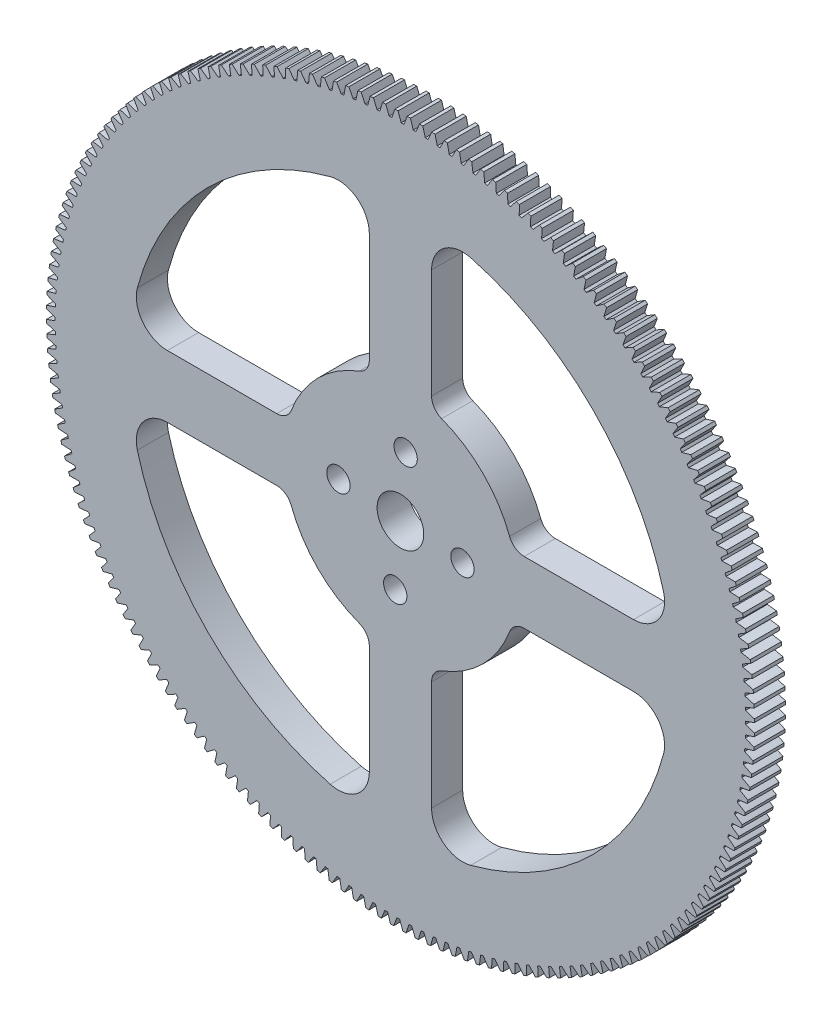
from build123d import *

# Parameters (mm, degrees)
EXTRUDE_1_DEPTH     = 4
SKETCH_3_R          = 3
CUT_EXTRUDE_1_DEPTH = 65.469457902
SKETCH_4_R          = 1.5
CUT_EXTRUDE_2_DEPTH = 65.469457902
CUT_EXTRUDE_3_DEPTH = 65.469457902
FILLET_1_R          = 4
FILLET_2_R          = 2


with BuildPart() as part:
    # 草图2 → 凸台-拉伸1 (new body)
    with BuildSketch(Plane.XY):
        with BuildLine():
            ThreePointArc((1.997756749, 44.330007816), (1.8226001, 44.337554667), (1.647415002, 44.344409443))
            add(Edge.make_bspline(
                [(1.647415002, 44.344409443), (1.633443837, 44.39470986), (1.551969329, 44.68227958), (1.462218223, 44.967470249), (1.365234375, 45.250245349), (1.280655932, 45.481973576)],
                knots=[0.083923072, 0.083923072, 0.083923072, 0.083923072, 0.083923072, 0.092110525, 0.130798496, 0.130798496, 0.130798496, 0.130798496, 0.130798496], degree=4))
            ThreePointArc((1.280655932, 45.481973576), (1.075107955, 45.4872965), (0.869538022, 45.49169049))
            add(Edge.make_bspline(
                [(0.449444808, 44.372723878), (0.465776898, 44.422308152), (0.560747049, 44.705707579), (0.663872373, 44.986339579), (0.774106809, 45.264216964), (0.869538022, 45.49169049)],
                knots=[0.083923059, 0.083923059, 0.083923059, 0.083923059, 0.083923059, 0.092110525, 0.130798484, 0.130798484, 0.130798484, 0.130798484, 0.130798484], degree=4))
            ThreePointArc((0.449444808, 44.372723878), (0.274131479, 44.374153253), (0.09881387, 44.374889981))
            add(Edge.make_bspline(
                [(0.09881387, 44.374889981), (0.083095757, 44.42467217), (-0.008365158, 44.709223291), (-0.1080146, 44.991107962), (-0.214808078, 45.270326115), (-0.307422196, 45.498961434)],
                knots=[0.083923072, 0.083923072, 0.083923072, 0.083923072, 0.083923072, 0.092110525, 0.130798496, 0.130798496, 0.130798496, 0.130798496, 0.130798496], degree=4))
            ThreePointArc((-0.307422196, 45.498961434), (-0.513030726, 45.497107595), (-0.71862878, 45.494324621))
            add(Edge.make_bspline(
                [(-1.099414712, 44.361378611), (-1.084823038, 44.411502661), (-0.999801237, 44.69804386), (-0.90653265, 44.982103928), (-0.806063146, 45.263659165), (-0.71862878, 45.494324621)],
                knots=[0.083923059, 0.083923059, 0.083923059, 0.083923059, 0.083923059, 0.092110525, 0.130798484, 0.130798484, 0.130798484, 0.130798484, 0.130798484], degree=4))
            ThreePointArc((-1.099414712, 44.361378611), (-1.27467113, 44.356688769), (-1.449907651, 44.351306551))
            add(Edge.make_bspline(
                [(-1.449907651, 44.351306551), (-1.467353562, 44.40050986), (-1.568689453, 44.681695701), (-1.678115825, 44.959930939), (-1.794588819, 45.235251961), (-1.895125777, 45.460515816)],
                knots=[0.083923072, 0.083923072, 0.083923072, 0.083923072, 0.083923072, 0.092110525, 0.130798496, 0.130798496, 0.130798496, 0.130798496, 0.130798496], degree=4))
            ThreePointArc((-1.895125777, 45.460515816), (-2.100544358, 45.451487472), (-2.305920042, 45.441530924))
            add(Edge.make_bspline(
                [(-2.646934765, 44.295985838), (-2.634101283, 44.346588596), (-2.559131419, 44.635922459), (-2.475833202, 44.923064513), (-2.385251038, 45.207954568), (-2.305920042, 45.441530924)],
                knots=[0.083923059, 0.083923059, 0.083923059, 0.083923059, 0.083923059, 0.092110525, 0.130798484, 0.130798484, 0.130798484, 0.130798484, 0.130798484], degree=4))
            ThreePointArc((-2.646934765, 44.295985838), (-2.821920748, 44.285182491), (-2.996862683, 44.273687886))
            add(Edge.make_bspline(
                [(-2.996862683, 44.273687886), (-3.016015138, 44.322252368), (-3.127102541, 44.599730347), (-3.246172523, 44.873977166), (-3.372183131, 45.145065621), (-3.48052044, 45.366683563)],
                knots=[0.083923072, 0.083923072, 0.083923072, 0.083923072, 0.083923072, 0.092110525, 0.130798496, 0.130798496, 0.130798496, 0.130798496, 0.130798496], degree=4))
            ThreePointArc((-3.48052044, 45.366683563), (-3.685498801, 45.350491713), (-3.890401897, 45.333373723))
            add(Edge.make_bspline(
                [(-4.191229936, 44.176625229), (-4.180170283, 44.227645043), (-4.115343694, 44.519419063), (-4.042117333, 44.809293263), (-3.961532869, 45.097171043), (-3.890401897, 45.333373723)],
                knots=[0.083923059, 0.083923059, 0.083923059, 0.083923059, 0.083923059, 0.092110525, 0.130798484, 0.130798484, 0.130798484, 0.130798484, 0.130798484], degree=4))
            ThreePointArc((-4.191229936, 44.176625229), (-4.36573229, 44.159721541), (-4.5401665, 44.142128553))
            add(Edge.make_bspline(
                [(-4.5401665, 44.142128553), (-4.561002163, 44.189995039), (-4.681705737, 44.463427091), (-4.810274261, 44.733351364), (-4.945668957, 44.999876973), (-5.061674624, 45.217578993)],
                knots=[0.083923072, 0.083923072, 0.083923072, 0.083923072, 0.083923072, 0.092110525, 0.130798496, 0.130798496, 0.130798496, 0.130798496, 0.130798496], degree=4))
            ThreePointArc((-5.061674624, 45.217578993), (-5.26596303, 45.194243365), (-5.470143896, 45.169984788))
            add(Edge.make_bspline(
                [(-5.730418738, 44.003442207), (-5.721146388, 44.054816918), (-5.666542057, 44.348675612), (-5.603476767, 44.640928792), (-5.532988183, 44.931443562), (-5.470143896, 45.169984788)],
                knots=[0.083923059, 0.083923059, 0.083923059, 0.083923059, 0.083923059, 0.092110525, 0.130798484, 0.130798484, 0.130798484, 0.130798484, 0.130798484], degree=4))
            ThreePointArc((-5.730418738, 44.003442207), (-5.904224861, 43.980458772), (-6.077938823, 43.956788835))
            add(Edge.make_bspline(
                [(-6.077938823, 43.956788835), (-6.10043231, 44.003899008), (-6.230604996, 44.272951999), (-6.36851542, 44.538224865), (-6.513129247, 44.799862907), (-6.636661938, 45.013383769)],
                knots=[0.083923072, 0.083923072, 0.083923072, 0.083923072, 0.083923072, 0.092110525, 0.130798496, 0.130798496, 0.130798496, 0.130798496, 0.130798496], degree=4))
            ThreePointArc((-6.636661938, 45.013383769), (-6.840011495, 44.982932794), (-7.043221367, 44.951563185))
            add(Edge.make_bspline(
                [(-7.262625908, 43.776647769), (-7.255152158, 43.828314784), (-7.210836611, 44.123900131), (-7.158009228, 44.418176225), (-7.097702402, 44.710974037), (-7.043221367, 44.951563185)],
                knots=[0.083923059, 0.083923059, 0.083923059, 0.083923059, 0.083923059, 0.092110525, 0.130798484, 0.130798484, 0.130798484, 0.130798484, 0.130798484], degree=4))
            ThreePointArc((-7.262625908, 43.776647769), (-7.435524042, 43.747612589), (-7.608306114, 43.717894541))
            add(Edge.make_bspline(
                [(-7.608306114, 43.717894541), (-7.63243002, 43.764191005), (-7.771913222, 44.028537134), (-7.918997525, 44.288835399), (-8.072654292, 44.545267108), (-8.203563501, 44.75434667)],
                knots=[0.083923072, 0.083923072, 0.083923072, 0.083923072, 0.083923072, 0.092110525, 0.130798496, 0.130798496, 0.130798496, 0.130798496, 0.130798496], degree=4))
            ThreePointArc((-8.203563501, 44.75434667), (-8.40572646, 44.716817448), (-8.607717758, 44.678375026))
            add(Edge.make_bspline(
                [(-8.785984687, 43.496518229), (-8.780318643, 43.5484146), (-8.746345871, 43.845366475), (-8.703820757, 44.141306953), (-8.653769164, 44.436031078), (-8.607717758, 44.678375026)],
                knots=[0.083923059, 0.083923059, 0.083923059, 0.083923059, 0.083923059, 0.092110525, 0.130798484, 0.130798484, 0.130798484, 0.130798484, 0.130798484], degree=4))
            ThreePointArc((-8.785984687, 43.496518229), (-8.957764183, 43.461466678), (-9.129403855, 43.425736727))
            add(Edge.make_bspline(
                [(-9.129403855, 43.425736727), (-9.155128789, 43.471163076), (-9.303752569, 43.730480279), (-9.45983155, 43.985486809), (-9.622344052, 44.236399763), (-9.760470286, 44.440783294)],
                knots=[0.083923072, 0.083923072, 0.083923072, 0.083923072, 0.083923072, 0.092110525, 0.130798496, 0.130798496, 0.130798496, 0.130798496, 0.130798496], degree=4))
            ThreePointArc((-9.760470286, 44.440783294), (-9.961200341, 44.396221548), (-10.161726971, 44.35075315))
            add(Edge.make_bspline(
                [(-10.298639097, 43.163394882), (-10.294787662, 43.215457381), (-10.271199056, 43.513413993), (-10.239028021, 43.810658297), (-10.199292642, 44.106949661), (-10.161726971, 44.35075315)],
                knots=[0.083923059, 0.083923059, 0.083923059, 0.083923059, 0.083923059, 0.092110525, 0.130798484, 0.130798484, 0.130798484, 0.130798484, 0.130798484], degree=4))
            ThreePointArc((-10.298639097, 43.163394882), (-10.469090668, 43.122369666), (-10.639378825, 43.080671341))
            add(Edge.make_bspline(
                [(-10.639378825, 43.080671341), (-10.666673445, 43.125172231), (-10.824256726, 43.37914457), (-10.989140228, 43.628548679), (-11.160310468, 43.873637179), (-11.305485441, 44.073075669)],
                knots=[0.083923072, 0.083923072, 0.083923072, 0.083923072, 0.083923072, 0.092110525, 0.130798496, 0.130798496, 0.130798496, 0.130798496, 0.130798496], degree=4))
            ThreePointArc((-11.305485441, 44.073075669), (-11.504538035, 44.021535691), (-11.703355685, 43.969096713))
            add(Edge.make_bspline(
                [(-11.798746202, 42.777683587), (-11.796714067, 42.829848784), (-11.783538368, 43.128447119), (-11.761760606, 43.426633103), (-11.732389853, 43.724130719), (-11.703355685, 43.969096713)],
                knots=[0.083923059, 0.083923059, 0.083923059, 0.083923059, 0.083923059, 0.092110525, 0.130798484, 0.130798484, 0.130798484, 0.130798484, 0.130798484], degree=4))
            ThreePointArc((-11.798746202, 42.777683587), (-11.967662179, 42.730734688), (-12.13639135, 42.683118794))
            add(Edge.make_bspline(
                [(-12.13639135, 42.683118794), (-12.165222402, 42.726640006), (-12.331573195, 42.974958055), (-12.505060332, 43.218455882), (-12.684679764, 43.457421326), (-12.836726604, 43.65167179)],
                knots=[0.083923072, 0.083923072, 0.083923072, 0.083923072, 0.083923072, 0.092110525, 0.130798496, 0.130798496, 0.130798496, 0.130798496, 0.130798496], degree=4))
            ThreePointArc((-12.836726604, 43.65167179), (-13.033859221, 43.593216374), (-13.230725663, 43.533870704))
            add(Edge.make_bspline(
                [(-13.284478352, 42.339854274), (-13.284267994, 42.392058614), (-13.281521252, 42.690934876), (-13.270163298, 42.989699246), (-13.251192954, 43.288040659), (-13.230725663, 43.533870704)],
                knots=[0.083923059, 0.083923059, 0.083923059, 0.083923059, 0.083923059, 0.092110525, 0.130798484, 0.130798484, 0.130798484, 0.130798484, 0.130798484], degree=4))
            ThreePointArc((-13.284478352, 42.339854274), (-13.451652937, 42.287038892), (-13.618617552, 42.233563441))
            add(Edge.make_bspline(
                [(-13.618617552, 42.233563441), (-13.648949909, 42.276051953), (-13.82386554, 42.518413174), (-14.005744945, 42.755708055), (-14.193594732, 42.9882593), (-14.352328192, 43.177085074)],
                knots=[0.083923072, 0.083923072, 0.083923072, 0.083923072, 0.083923072, 0.092110525, 0.130798496, 0.130798496, 0.130798496, 0.130798496, 0.130798496], degree=4))
            ThreePointArc((-14.352328192, 43.177085074), (-14.547300657, 43.111785437), (-14.741976039, 43.045605379))
            add(Edge.make_bspline(
                [(-14.754025411, 41.85044037), (-14.755637087, 41.90262025), (-14.763322649, 42.201410305), (-14.76239834, 42.500389063), (-14.753851517, 42.799210789), (-14.741976039, 43.045605379)],
                knots=[0.083923059, 0.083923059, 0.083923059, 0.083923059, 0.083923059, 0.092110525, 0.130798484, 0.130798484, 0.130798484, 0.130798484, 0.130798484], degree=4))
            ThreePointArc((-14.754025411, 41.85044037), (-14.919254928, 41.791822853), (-15.084251566, 41.732552997))
            add(Edge.make_bspline(
                [(-15.084251566, 41.732552997), (-15.116048273, 41.773957042), (-15.299315635, 42.010066156), (-15.489365716, 42.240868983), (-15.685216991, 42.466722701), (-15.85044368, 42.64989373)],
                knots=[0.083923072, 0.083923072, 0.083923072, 0.083923072, 0.083923072, 0.092110525, 0.130798496, 0.130798496, 0.130798496, 0.130798496, 0.130798496], degree=4))
            ThreePointArc((-15.85044368, 42.64989373), (-16.043018448, 42.577829431), (-16.235265588, 42.504895615))
            add(Edge.make_bspline(
                [(-16.205596963, 41.310038151), (-16.209028709, 41.362129998), (-16.227137212, 41.660469816), (-16.236647674, 41.959298702), (-16.238534785, 42.258236674), (-16.235265588, 42.504895615)],
                knots=[0.083923059, 0.083923059, 0.083923059, 0.083923059, 0.083923059, 0.092110525, 0.130798484, 0.130798484, 0.130798484, 0.130798484, 0.130798484], degree=4))
            ThreePointArc((-16.205596963, 41.310038151), (-16.368680105, 41.245689916), (-16.531507744, 41.180697866))
            add(Edge.make_bspline(
                [(-16.531507744, 41.180697866), (-16.564730061, 41.220966999), (-16.756125871, 41.450536343), (-16.954115081, 41.67456592), (-17.15772923, 41.893446942), (-17.329247844, 42.07074006)],
                knots=[0.083923072, 0.083923072, 0.083923072, 0.083923072, 0.083923072, 0.092110525, 0.130798496, 0.130798496, 0.130798496, 0.130798496, 0.130798496], degree=4))
            ThreePointArc((-17.329247844, 42.07074006), (-17.519190293, 41.991998898), (-17.708774968, 41.912400184))
            add(Edge.make_bspline(
                [(-17.637424491, 40.719306015), (-17.642672126, 40.771246362), (-17.671181507, 41.068772462), (-17.691115154, 41.367087399), (-17.7034339, 41.665777407), (-17.708774968, 41.912400184)],
                knots=[0.083923059, 0.083923059, 0.083923059, 0.083923059, 0.083923059, 0.092110525, 0.130798484, 0.130798484, 0.130798484, 0.130798484, 0.130798484], degree=4))
            ThreePointArc((-17.637424491, 40.719306015), (-17.798162566, 40.649305459), (-17.958622825, 40.578670397))
            add(Edge.make_bspline(
                [(-17.958622825, 40.578670397), (-17.993230277, 40.617755557), (-18.192521348, 40.840505436), (-18.398208468, 41.057488817), (-18.609337418, 41.269130472), (-18.786938988, 41.440329674)],
                knots=[0.083923072, 0.083923072, 0.083923072, 0.083923072, 0.083923072, 0.092110525, 0.130798496, 0.130798496, 0.130798496, 0.130798496, 0.130798496], degree=4))
            ThreePointArc((-18.786938988, 41.440329674), (-18.974017702, 41.355007583), (-19.160708932, 41.268840948))
            add(Edge.make_bspline(
                [(-19.047763535, 40.078963676), (-19.054820665, 40.130689243), (-19.09369619, 40.427039135), (-19.124028735, 40.724476672), (-19.146764108, 41.022554808), (-19.160708932, 41.268840948)],
                knots=[0.083923059, 0.083923059, 0.083923059, 0.083923059, 0.083923059, 0.092110525, 0.130798484, 0.130798484, 0.130798484, 0.130798484, 0.130798484], degree=4))
            ThreePointArc((-19.047763535, 40.078963676), (-19.205960708, 40.003396084), (-19.363858091, 39.92720407))
            add(Edge.make_bspline(
                [(-19.363858091, 39.92720407), (-19.399808513, 39.965057638), (-19.60675204, 40.180716665), (-19.819886472, 40.390389488), (-20.038272996, 40.594533923), (-20.221741141, 40.759430629)],
                knots=[0.083923072, 0.083923072, 0.083923072, 0.083923072, 0.083923072, 0.092110525, 0.130798496, 0.130798496, 0.130798496, 0.130798496, 0.130798496], degree=4))
            ThreePointArc((-20.221741141, 40.759430629), (-20.405728194, 40.667631562), (-20.589298525, 40.575001987))
            add(Edge.make_bspline(
                [(-20.434895813, 39.389791293), (-20.44375384, 39.44123906), (-20.492948145, 39.736051687), (-20.533642632, 40.032249443), (-20.566766933, 40.329352545), (-20.589298525, 40.575001987)],
                knots=[0.083923059, 0.083923059, 0.083923059, 0.083923059, 0.083923059, 0.092110525, 0.130798484, 0.130798484, 0.130798484, 0.130798484, 0.130798484], degree=4))
            ThreePointArc((-20.434895813, 39.389791293), (-20.590359346, 39.308748734), (-20.745501479, 39.227092594))
            add(Edge.make_bspline(
                [(-20.745501479, 39.227092594), (-20.782751071, 39.263668451), (-20.997094926, 39.47197388), (-21.217416998, 39.674080691), (-21.442795024, 39.870479187), (-21.631906218, 40.028872497)],
                knots=[0.083923072, 0.083923072, 0.083923072, 0.083923072, 0.083923072, 0.092110525, 0.130798496, 0.130798496, 0.130798496, 0.130798496, 0.130798496], degree=4))
            ThreePointArc((-21.631906218, 40.028872497), (-21.81257745, 39.930708296), (-21.992803229, 39.831728636))
            add(Edge.make_bspline(
                [(-21.797131318, 38.652628518), (-21.80777945, 38.703735803), (-21.8672326, 38.996651982), (-21.91823945, 39.291249085), (-21.96171232, 39.587015178), (-21.992803229, 39.831728636)],
                knots=[0.083923059, 0.083923059, 0.083923059, 0.083923059, 0.083923059, 0.092110525, 0.130798484, 0.130798484, 0.130798484, 0.130798484, 0.130798484], degree=4))
            ThreePointArc((-21.797131318, 38.652628518), (-21.949671802, 38.566209728), (-22.101869668, 38.479188949))
            add(Edge.make_bspline(
                [(-22.101869668, 38.479188949), (-22.140373048, 38.514442533), (-22.361856085, 38.715140575), (-22.589097369, 38.909435139), (-22.821192309, 39.097848414), (-23.015716149, 39.24954535)],
                knots=[0.083923072, 0.083923072, 0.083923072, 0.083923072, 0.083923072, 0.092110525, 0.130798496, 0.130798496, 0.130798496, 0.130798496, 0.130798496], degree=4))
            ThreePointArc((-23.015716149, 39.24954535), (-23.192851439, 39.145135612), (-23.369513089, 39.03992646))
            add(Edge.make_bspline(
                [(-23.132810376, 37.868373468), (-23.14523564, 37.919078006), (-23.2148752, 38.209740863), (-23.276132268, 38.502378393), (-23.329900744, 38.796447131), (-23.369513089, 39.03992646)],
                knots=[0.083923059, 0.083923059, 0.083923059, 0.083923059, 0.083923059, 0.092110525, 0.130798484, 0.130798484, 0.130798484, 0.130798484, 0.130798484], degree=4))
            ThreePointArc((-23.132810376, 37.868373468), (-23.282241964, 37.776683736), (-23.431310134, 37.684404339))
            add(Edge.make_bspline(
                [(-23.431310134, 37.684404339), (-23.471020392, 37.718292699), (-23.699372767, 37.911138835), (-23.933256404, 38.097384433), (-24.171785487, 38.277582935), (-24.371484975, 38.422398677)],
                knots=[0.083923072, 0.083923072, 0.083923072, 0.083923072, 0.083923072, 0.092110525, 0.130798496, 0.130798496, 0.130798496, 0.130798496, 0.130798496], degree=4))
            ThreePointArc((-24.371484975, 38.422398677), (-24.544868512, 38.311870611), (-24.717750798, 38.200560146))
            add(Edge.make_bspline(
                [(-24.440305668, 37.037981639), (-24.454492926, 37.088221653), (-24.53423405, 37.376277061), (-24.605666705, 37.666598483), (-24.669665278, 37.95861159), (-24.717750798, 38.200560146)],
                knots=[0.083923059, 0.083923059, 0.083923059, 0.083923059, 0.083923059, 0.092110525, 0.130798484, 0.130798484, 0.130798484, 0.130798484, 0.130798484], degree=4))
            ThreePointArc((-24.440305668, 37.037981639), (-24.586446301, 36.941132675), (-24.732203158, 36.843707087))
            add(Edge.make_bspline(
                [(-24.732203158, 36.843707087), (-24.773071912, 36.876188935), (-25.008015415, 37.060948211), (-25.248256453, 37.238917933), (-25.492929068, 37.410682118), (-25.697560901, 37.548440231)],
                knots=[0.083923072, 0.083923072, 0.083923072, 0.083923072, 0.083923072, 0.092110525, 0.130798496, 0.130798496, 0.130798496, 0.130798496, 0.130798496], degree=4))
            ThreePointArc((-25.697560901, 37.548440231), (-25.866981443, 37.431928497), (-26.035873735, 37.314652335))
            add(Edge.make_bspline(
                [(-25.718024212, 36.162464734), (-25.733956178, 36.212179016), (-25.823701716, 36.497276023), (-25.905222927, 36.784927625), (-25.979373624, 37.074529327), (-26.035873735, 37.314652335)],
                knots=[0.083923059, 0.083923059, 0.083923059, 0.083923059, 0.083923059, 0.092110525, 0.130798484, 0.130798484, 0.130798484, 0.130798484, 0.130798484], degree=4))
            ThreePointArc((-25.718024212, 36.162464734), (-25.86069584, 36.060574533), (-26.002963802, 35.958121454))
            add(Edge.make_bspline(
                [(-26.002963802, 35.958121454), (-26.04494126, 35.989157216), (-26.286189647, 36.165604532), (-26.532495391, 36.335081548), (-26.783013442, 36.498202148), (-26.992328307, 36.628734794)],
                knots=[0.083923072, 0.083923072, 0.083923072, 0.083923072, 0.083923072, 0.092110525, 0.130798496, 0.130798496, 0.130798496, 0.130798496, 0.130798496], degree=4))
            ThreePointArc((-26.992328307, 36.628734794), (-27.157579442, 36.506381344), (-27.32227597, 36.383282367))
            add(Edge.make_bspline(
                [(-26.964409305, 35.242889436), (-26.98206657, 35.292017416), (-27.081707179, 35.573808675), (-27.173217626, 35.858439998), (-27.257430106, 36.145277462), (-27.32227597, 36.383282367)],
                knots=[0.083923059, 0.083923059, 0.083923059, 0.083923059, 0.083923059, 0.092110525, 0.130798484, 0.130798484, 0.130798484, 0.130798484, 0.130798484], degree=4))
            ThreePointArc((-26.964409305, 35.242889436), (-27.103438105, 35.136082136), (-27.242043841, 35.028726388))
            add(Edge.make_bspline(
                [(-27.242043841, 35.028726388), (-27.285078859, 35.058278252), (-27.532338207, 35.226198634), (-27.784408571, 35.386976462), (-28.040466839, 35.54125474), (-28.254209719, 35.664402885)],
                knots=[0.083923072, 0.083923072, 0.083923072, 0.083923072, 0.083923072, 0.092110525, 0.130798496, 0.130798496, 0.130798496, 0.130798496, 0.130798496], degree=4))
            ThreePointArc((-28.254209719, 35.664402885), (-28.415090114, 35.536356789), (-28.575390221, 35.407584974))
            add(Edge.make_bspline(
                [(-28.177942419, 34.280376107), (-28.197303469, 34.328857929), (-28.306717753, 34.607000122), (-28.408105944, 34.888264387), (-28.502277607, 35.171988143), (-28.575390221, 35.407584974)],
                knots=[0.083923059, 0.083923059, 0.083923059, 0.083923059, 0.083923059, 0.092110525, 0.130798484, 0.130798484, 0.130798484, 0.130798484, 0.130798484], degree=4))
            ThreePointArc((-28.177942419, 34.280376107), (-28.313159005, 34.168781836), (-28.447933645, 34.056654216))
            add(Edge.make_bspline(
                [(-28.447933645, 34.056654216), (-28.491973792, 34.084686176), (-28.744942853, 34.243875039), (-29.002470728, 34.395757797), (-29.263757247, 34.541005788), (-29.481667729, 34.656619396)],
                knots=[0.083923072, 0.083923072, 0.083923072, 0.083923072, 0.083923072, 0.092110525, 0.130798496, 0.130798496, 0.130798496, 0.130798496, 0.130798496], degree=4))
            ThreePointArc((-29.481667729, 34.656619396), (-29.637981375, 34.523036657), (-29.79368976, 34.388748894))
            add(Edge.make_bspline(
                [(-29.357145051, 33.276097419), (-29.378186298, 33.323874017), (-29.497240952, 33.59802827), (-29.608383362, 33.875582799), (-29.712399474, 34.155847175), (-29.79368976, 34.388748894)],
                knots=[0.083923059, 0.083923059, 0.083923059, 0.083923059, 0.083923059, 0.092110525, 0.130798484, 0.130798484, 0.130798484, 0.130798484, 0.130798484], degree=4))
            ThreePointArc((-29.357145051, 33.276097419), (-29.488384683, 33.159852138), (-29.619164024, 33.043089256))
            add(Edge.make_bspline(
                [(-29.619164024, 33.043089256), (-29.664155644, 33.069567161), (-29.922526215, 33.219830557), (-30.185197842, 33.362633199), (-30.451394274, 33.498673941), (-30.673206867, 33.606612154)],
                knots=[0.083923072, 0.083923072, 0.083923072, 0.083923072, 0.083923072, 0.092110525, 0.130798496, 0.130798496, 0.130798496, 0.130798496, 0.130798496], degree=4))
            ThreePointArc((-30.673206867, 33.606612154), (-30.824763322, 33.467655522), (-30.975690278, 33.328015419))
            add(Edge.make_bspline(
                [(-30.500580523, 32.231276933), (-30.523276332, 32.278290097), (-30.651826307, 32.548122395), (-30.772587525, 32.821629032), (-30.886321359, 33.098092568), (-30.975690278, 33.328015419)],
                knots=[0.083923059, 0.083923059, 0.083923059, 0.083923059, 0.083923059, 0.092110525, 0.130798484, 0.130798484, 0.130798484, 0.130798484, 0.130798484], degree=4))
            ThreePointArc((-30.500580523, 32.231276933), (-30.627683306, 32.110522268), (-30.754308014, 31.989266381))
            add(Edge.make_bspline(
                [(-30.754308014, 31.989266381), (-30.800196292, 32.014157972), (-31.063653587, 32.155312829), (-31.331148943, 32.288861372), (-31.601930969, 32.415529119), (-31.827375429, 32.515660432)],
                knots=[0.083923072, 0.083923072, 0.083923072, 0.083923072, 0.083923072, 0.092110525, 0.130798496, 0.130798496, 0.130798496, 0.130798496, 0.130798496], degree=4))
            ThreePointArc((-31.827375429, 32.515660432), (-31.973990043, 32.371499205), (-32.119951689, 32.226676892))
            add(Edge.make_bspline(
                [(-31.606855737, 31.147187601), (-31.631178456, 31.193380054), (-31.769067132, 31.458561647), (-31.89930003, 31.727687165), (-32.022613019, 32.000013034), (-32.119951689, 32.226676892)],
                knots=[0.083923059, 0.083923059, 0.083923059, 0.083923059, 0.083923059, 0.092110525, 0.130798484, 0.130798484, 0.130798484, 0.130798484, 0.130798484], degree=4))
            ThreePointArc((-31.606855737, 31.147187601), (-31.729666815, 31.022070673), (-31.851982617, 30.896469513))
            add(Edge.make_bspline(
                [(-31.851982617, 30.896469513), (-31.898711646, 30.919744463), (-32.166934683, 31.051618805), (-32.438927864, 31.175750541), (-32.713965578, 31.292890969), (-32.942767236, 31.385093386)],
                knots=[0.083923072, 0.083923072, 0.083923072, 0.083923072, 0.083923072, 0.092110525, 0.130798496, 0.130798496, 0.130798496, 0.130798496, 0.130798496], degree=4))
            ThreePointArc((-32.942767236, 31.385093386), (-33.084261381, 31.235903202), (-33.225079886, 31.086075123))
            add(Edge.make_bspline(
                [(-32.674622865, 30.025150218), (-32.700542861, 30.070465681), (-32.847602244, 30.330673488), (-32.987148152, 30.595089999), (-33.119890058, 30.862946413), (-33.225079886, 31.086075123)],
                knots=[0.083923059, 0.083923059, 0.083923059, 0.083923059, 0.083923059, 0.092110525, 0.130798484, 0.130798484, 0.130798484, 0.130798484, 0.130798484], degree=4))
            ThreePointArc((-32.674622865, 30.025150218), (-32.792992612, 29.895823463), (-32.910850485, 29.766030057))
            add(Edge.make_bspline(
                [(-32.910850485, 29.766030057), (-32.958363332, 29.787660008), (-33.231025323, 29.910093167), (-33.507184949, 30.02465686), (-33.786143259, 30.132127252), (-34.018023355, 30.216288439)],
                knots=[0.083923072, 0.083923072, 0.083923072, 0.083923072, 0.083923072, 0.092110525, 0.130798496, 0.130798496, 0.130798496, 0.130798496, 0.130798496], degree=4))
            ThreePointArc((-34.018023355, 30.216288439), (-34.154224644, 30.062251063), (-34.289728441, 29.90759976))
            add(Edge.make_bspline(
                [(-33.702580999, 28.866531815), (-33.730066691, 28.910915078), (-33.886117611, 29.165832075), (-34.034806515, 29.425217429), (-34.176815612, 29.688278046), (-34.289728441, 29.90759976)],
                knots=[0.083923059, 0.083923059, 0.083923059, 0.083923059, 0.083923059, 0.092110525, 0.130798484, 0.130798484, 0.130798484, 0.130798484, 0.130798484], degree=4))
            ThreePointArc((-33.702580999, 28.866531815), (-33.8163652, 28.733152797), (-33.929621552, 28.599325277))
            add(Edge.make_bspline(
                [(-33.929621552, 28.599325277), (-33.97786033, 28.619283878), (-34.254629078, 28.732126688), (-34.534618691, 28.836982759), (-34.817157729, 28.934652179), (-35.051833753, 29.010669598)],
                knots=[0.083923072, 0.083923072, 0.083923072, 0.083923072, 0.083923072, 0.092110525, 0.130798496, 0.130798496, 0.130798496, 0.130798496, 0.130798496], degree=4))
            ThreePointArc((-35.051833753, 29.010669598), (-35.182576245, 28.851972701), (-35.312600244, 28.692686594))
            add(Edge.make_bspline(
                [(-34.689477729, 27.672743989), (-34.718495632, 27.716140978), (-34.883347964, 27.965456588), (-35.040998709, 28.219494764), (-35.192101981, 28.477439086), (-35.312600244, 28.692686594)],
                knots=[0.083923059, 0.083923059, 0.083923059, 0.083923059, 0.083923059, 0.092110525, 0.130798484, 0.130798484, 0.130798484, 0.130798484, 0.130798484], degree=4))
            ThreePointArc((-34.689477729, 27.672743989), (-34.798537755, 27.535475211), (-34.907054602, 27.397776626))
            add(Edge.make_bspline(
                [(-34.907054602, 27.397776626), (-34.955960539, 27.416039559), (-35.236498845, 27.519154538), (-35.519977319, 27.614175238), (-35.805752856, 27.701924689), (-36.042938891, 27.769705726)],
                knots=[0.083923072, 0.083923072, 0.083923072, 0.083923072, 0.083923072, 0.092110525, 0.130798496, 0.130798496, 0.130798496, 0.130798496, 0.130798496], degree=4))
            ThreePointArc((-36.042938891, 27.769705726), (-36.168063296, 27.606542655), (-36.292449084, 27.442815809))
            add(Edge.make_bspline(
                [(-35.634110674, 26.445241187), (-35.664625433, 26.48759903), (-35.838078331, 26.731009501), (-36.004498844, 26.979390991), (-36.164512195, 27.231904752), (-36.292449084, 27.442815809)],
                knots=[0.083923059, 0.083923059, 0.083923059, 0.083923059, 0.083923059, 0.092110525, 0.130798484, 0.130798484, 0.130798484, 0.130798484, 0.130798484], degree=4))
            ThreePointArc((-35.634110674, 26.445241187), (-35.738313652, 26.30424989), (-35.841958782, 26.162848003))
            add(Edge.make_bspline(
                [(-35.841958782, 26.162848003), (-35.891472295, 26.179393019), (-36.175438365, 26.272654537), (-36.462060326, 26.357724097), (-36.750724188, 26.435446671), (-36.99013126, 26.494908745)],
                knots=[0.083923072, 0.083923072, 0.083923072, 0.083923072, 0.083923072, 0.092110525, 0.130798496, 0.130798496, 0.130798496, 0.130798496, 0.130798496], degree=4))
            ThreePointArc((-36.99013126, 26.494908745), (-37.109485134, 26.32747829), (-37.228081164, 26.15951018))
            add(Edge.make_bspline(
                [(-36.535328944, 25.185518933), (-36.567303382, 25.226786023), (-36.74914552, 25.463994795), (-36.924133043, 25.706416987), (-37.092861522, 25.953192538), (-37.228081164, 26.15951018)],
                knots=[0.083923059, 0.083923059, 0.083923059, 0.083923059, 0.083923059, 0.092110525, 0.130798484, 0.130798484, 0.130798484, 0.130798484, 0.130798484], degree=4))
            ThreePointArc((-36.535328944, 25.185518933), (-36.63454792, 25.040976892), (-36.733195057, 24.896043981))
            add(Edge.make_bspline(
                [(-36.733195057, 24.896043981), (-36.78325582, 24.910850921), (-37.070303685, 24.994145354), (-37.359719929, 25.069160129), (-37.650920423, 25.136761134), (-37.892256852, 25.187831798)],
                knots=[0.083923072, 0.083923072, 0.083923072, 0.083923072, 0.083923072, 0.092110525, 0.130798496, 0.130798496, 0.130798496, 0.130798496, 0.130798496], degree=4))
            ThreePointArc((-37.892256852, 25.187831798), (-38.00569478, 25.016337947), (-38.118356562, 24.844333217))
            add(Edge.make_bspline(
                [(-37.392034544, 23.895112003), (-37.425429704, 23.935238063), (-37.615439536, 24.165956135), (-37.798780874, 24.402123672), (-37.97601891, 24.642860356), (-38.118356562, 24.844333217)],
                knots=[0.083923059, 0.083923059, 0.083923059, 0.083923059, 0.083923059, 0.092110525, 0.130798484, 0.130798484, 0.130798484, 0.130798484, 0.130798484], degree=4))
            ThreePointArc((-37.392034544, 23.895112003), (-37.486148633, 23.747195322), (-37.579677592, 23.598907964))
            add(Edge.make_bspline(
                [(-37.579677592, 23.598907964), (-37.630224614, 23.611958789), (-37.920004551, 23.685184655), (-38.211862468, 23.750053252), (-38.505244812, 23.807450325), (-38.748216565, 23.850067358)],
                knots=[0.083923072, 0.083923072, 0.083923072, 0.083923072, 0.083923072, 0.092110525, 0.130798496, 0.130798496, 0.130798496, 0.130798496, 0.130798496], degree=4))
            ThreePointArc((-38.748216565, 23.850067358), (-38.855600341, 23.67471905), (-38.962190614, 23.498887261))
            add(Edge.make_bspline(
                [(-38.20318371, 22.57559256), (-38.237958905, 22.614528702), (-38.435904933, 22.838474979), (-38.627376712, 23.06810013), (-38.812908369, 23.302504644), (-38.962190614, 23.498887261)],
                knots=[0.083923059, 0.083923059, 0.083923059, 0.083923059, 0.083923059, 0.092110525, 0.130798484, 0.130798484, 0.130798484, 0.130798484, 0.130798484], degree=4))
            ThreePointArc((-38.20318371, 22.57559256), (-38.292078249, 22.424481451), (-38.380375078, 22.273020313))
            add(Edge.make_bspline(
                [(-38.380375078, 22.273020313), (-38.431346775, 22.284299122), (-38.723505733, 22.347367206), (-39.017449739, 22.402010593), (-39.312656492, 22.449133805), (-39.556967546, 22.483245286)],
                knots=[0.083923072, 0.083923072, 0.083923072, 0.083923072, 0.083923072, 0.092110525, 0.130798496, 0.130798496, 0.130798496, 0.130798496, 0.130798496], degree=4))
            ThreePointArc((-39.556967546, 22.483245286), (-39.658166339, 22.304256155), (-39.758555239, 22.124811531))
            add(Edge.make_bspline(
                [(-38.96778818, 21.228568236), (-39.003901044, 21.266267021), (-39.2095421, 21.48316866), (-39.408911042, 21.70597166), (-39.602510278, 21.93375842), (-39.758555239, 22.124811531)],
                knots=[0.083923059, 0.083923059, 0.083923059, 0.083923059, 0.083923059, 0.092110525, 0.130798484, 0.130798484, 0.130798484, 0.130798484, 0.130798484], degree=4))
            ThreePointArc((-38.96778818, 21.228568236), (-39.051354866, 21.074446804), (-39.13431199, 20.919996417))
            add(Edge.make_bspline(
                [(-39.13431199, 20.919996417), (-39.185646261, 20.929489469), (-39.479828288, 20.982322934), (-39.775500258, 21.026674535), (-40.072171755, 21.063466474), (-40.317524455, 21.089030842)],
                knots=[0.083923072, 0.083923072, 0.083923072, 0.083923072, 0.083923072, 0.092110525, 0.130798496, 0.130798496, 0.130798496, 0.130798496, 0.130798496], degree=4))
            ThreePointArc((-40.317524455, 21.089030842), (-40.41241497, 20.90661896), (-40.506480189, 20.723780126))
            add(Edge.make_bspline(
                [(-39.684916404, 19.85568017), (-39.722322937, 19.89209567), (-39.935408481, 20.101688409), (-40.142431685, 20.317397808), (-40.343862628, 20.538289291), (-40.506480189, 20.723780126)],
                knots=[0.083923059, 0.083923059, 0.083923059, 0.083923059, 0.083923059, 0.092110525, 0.130798484, 0.130798484, 0.130798484, 0.130798484, 0.130798484], degree=4))
            ThreePointArc((-39.684916404, 19.85568017), (-39.763053423, 19.69873619), (-39.84056977, 19.541484728))
            add(Edge.make_bspline(
                [(-39.84056977, 19.541484728), (-39.892204073, 19.549180457), (-40.188050753, 19.591714932), (-40.485090456, 19.625720713), (-40.782865249, 19.652136553), (-41.028960671, 19.669122662)],
                knots=[0.083923072, 0.083923072, 0.083923072, 0.083923072, 0.083923072, 0.092110525, 0.130798496, 0.130798496, 0.130798496, 0.130798496, 0.130798496], degree=4))
            ThreePointArc((-41.028960671, 19.669122662), (-41.117427298, 19.483510269), (-41.205054232, 19.297499988))
            add(Edge.make_bspline(
                [(-40.35369467, 18.458601017), (-40.392349298, 18.493688865), (-40.612619717, 18.695717347), (-40.827044958, 18.904070336), (-41.036062197, 19.117797419), (-41.205054232, 19.297499988)],
                knots=[0.083923059, 0.083923059, 0.083923059, 0.083923059, 0.083923059, 0.092110525, 0.130798484, 0.130798484, 0.130798484, 0.130798484, 0.130798484], degree=4))
            ThreePointArc((-40.35369467, 18.458601017), (-40.426306824, 18.299025701), (-40.498287953, 18.13916475))
            add(Edge.make_bspline(
                [(-40.498287953, 18.13916475), (-40.550159379, 18.14505378), (-40.847310269, 18.177237444), (-41.145355809, 18.200855973), (-41.443871104, 18.216863531), (-41.690409418, 18.225250686)],
                knots=[0.083923072, 0.083923072, 0.083923072, 0.083923072, 0.083923072, 0.092110525, 0.130798496, 0.130798496, 0.130798496, 0.130798496, 0.130798496], degree=4))
            ThreePointArc((-41.690409418, 18.225250686), (-41.772344374, 18.036663923), (-41.853426263, 17.847708818))
            add(Edge.make_bspline(
                [(-40.973308174, 17.039032902), (-41.013163804, 17.072750348), (-41.240350732, 17.266968433), (-41.461916766, 17.467711166), (-41.678265644, 17.674013456), (-41.853426263, 17.847708818)],
                knots=[0.083923059, 0.083923059, 0.083923059, 0.083923059, 0.083923059, 0.092110525, 0.130798484, 0.130798484, 0.130798484, 0.130798484, 0.130798484], degree=4))
            ThreePointArc((-40.973308174, 17.039032902), (-41.040306997, 16.877020667), (-41.106665211, 16.714744994))
            add(Edge.make_bspline(
                [(-41.106665211, 16.714744994), (-41.158710562, 16.71882015), (-41.456803629, 16.740613792), (-41.755491883, 16.753816294), (-42.054383987, 16.759396067), (-42.301064823, 16.75917405)],
                knots=[0.083923072, 0.083923072, 0.083923072, 0.083923072, 0.083923072, 0.092110525, 0.130798496, 0.130798496, 0.130798496, 0.130798496, 0.130798496], degree=4))
            ThreePointArc((-42.301064823, 16.75917405), (-42.376368284, 16.56784268), (-42.450806342, 16.376172964))
            add(Edge.make_bspline(
                [(-41.543002015, 15.59870535), (-41.584010087, 15.631011315), (-41.817836733, 15.817182378), (-42.046273615, 16.010070281), (-42.269690545, 16.20869643), (-42.450806342, 16.376172964)],
                knots=[0.083923059, 0.083923059, 0.083923059, 0.083923059, 0.083923059, 0.092110525, 0.130798484, 0.130798484, 0.130798484, 0.130798484, 0.130798484], degree=4))
            ThreePointArc((-41.543002015, 15.59870535), (-41.604305878, 15.434453583), (-41.664960329, 15.269960896))
            add(Edge.make_bspline(
                [(-41.664960329, 15.269960896), (-41.717116196, 15.272217213), (-42.015788261, 15.283594281), (-42.314755322, 15.286364671), (-42.61366008, 15.281509861), (-42.860182897, 15.272678942)],
                knots=[0.083923072, 0.083923072, 0.083923072, 0.083923072, 0.083923072, 0.092110525, 0.130798496, 0.130798496, 0.130798496, 0.130798496, 0.130798496], degree=4))
            ThreePointArc((-42.860182897, 15.272678942), (-42.928763116, 15.078836073), (-42.996466652, 14.884685266))
            add(Edge.make_bspline(
                [(-42.062082106, 14.139373179), (-42.10419266, 14.170228302), (-42.344374141, 14.348125523), (-42.579403556, 14.532923591), (-42.80961634, 14.723631604), (-42.996466652, 14.884685266)],
                knots=[0.083923059, 0.083923059, 0.083923059, 0.083923059, 0.083923059, 0.092110525, 0.130798484, 0.130798484, 0.130798484, 0.130798484, 0.130798484], degree=4))
            ThreePointArc((-42.062082106, 14.139373179), (-42.117616321, 13.973081995), (-42.172493111, 13.806572703))
            add(Edge.make_bspline(
                [(-42.172493111, 13.806572703), (-42.22469595, 13.807007431), (-42.523583126, 13.807954064), (-42.822464749, 13.800288966), (-43.121017993, 13.785005488), (-43.36708244, 13.767576427)],
                knots=[0.083923072, 0.083923072, 0.083923072, 0.083923072, 0.083923072, 0.092110525, 0.130798496, 0.130798496, 0.130798496, 0.130798496, 0.130798496], degree=4))
            ThreePointArc((-43.36708244, 13.767576427), (-43.428855864, 13.571458226), (-43.48974239, 13.375062872))
            add(Edge.make_bspline(
                [(-42.52991603, 12.662814359), (-42.573077759, 12.692181049), (-42.819321452, 12.861587686), (-43.060657052, 13.038070773), (-43.297385211, 13.220628301), (-43.48974239, 13.375062872)],
                knots=[0.083923059, 0.083923059, 0.083923059, 0.083923059, 0.083923059, 0.092110525, 0.130798484, 0.130798484, 0.130798484, 0.130798484, 0.130798484], degree=4))
            ThreePointArc((-42.52991603, 12.662814359), (-42.579612936, 12.49468636), (-42.628645206, 12.326363328))
            add(Edge.make_bspline(
                [(-42.628645206, 12.326363328), (-42.680831417, 12.324975938), (-42.979569555, 12.315490983), (-43.2780016, 12.297399736), (-43.575839587, 12.27170621), (-43.821145873, 12.245700241)],
                knots=[0.083923072, 0.083923072, 0.083923072, 0.083923072, 0.083923072, 0.092110525, 0.130798496, 0.130798496, 0.130798496, 0.130798496, 0.130798496], degree=4))
            ThreePointArc((-43.821145873, 12.245700241), (-43.87603724, 12.047545649), (-43.930032577, 11.849145024))
            add(Edge.make_bspline(
                [(-42.945933802, 11.17082785), (-42.990094121, 11.198670328), (-43.242100015, 11.359379987), (-43.489447772, 11.527333074), (-43.732402887, 11.7015177), (-43.930032577, 11.849145024)],
                knots=[0.083923059, 0.083923059, 0.083923059, 0.083923059, 0.083923059, 0.092110525, 0.130798484, 0.130798484, 0.130798484, 0.130798484, 0.130798484], degree=4))
            ThreePointArc((-42.945933802, 11.17082785), (-42.989732852, 11.001067873), (-43.032860864, 10.831136177))
            add(Edge.make_bspline(
                [(-43.032860864, 10.831136177), (-43.084966865, 10.827928361), (-43.383192, 10.808023372), (-43.680810872, 10.779528018), (-43.977570733, 10.743455748), (-44.22181999, 10.708904555)],
                knots=[0.083923072, 0.083923072, 0.083923072, 0.083923072, 0.083923072, 0.092110525, 0.130798496, 0.130798496, 0.130798496, 0.130798496, 0.130798496], degree=4))
            ThreePointArc((-44.22181999, 10.708904555), (-44.269762423, 10.508954992), (-44.316800786, 10.308790818))
            add(Edge.make_bspline(
                [(-43.309628569, 9.665231408), (-43.354733675, 9.691515753), (-43.61219474, 9.843332633), (-43.865253298, 10.002551095), (-44.114139367, 10.168150601), (-44.316800786, 10.308790818)],
                knots=[0.083923059, 0.083923059, 0.083923059, 0.083923059, 0.083923059, 0.092110525, 0.130798484, 0.130798484, 0.130798484, 0.130798484, 0.130798484], degree=4))
            ThreePointArc((-43.309628569, 9.665231408), (-43.3474764, 9.49404628), (-43.384647609, 9.322712956))
            add(Edge.make_bspline(
                [(-43.384647609, 9.322712956), (-43.436609917, 9.31768862), (-43.733958707, 9.287387851), (-44.030401805, 9.248523106), (-44.325721984, 9.202116041), (-44.568616631, 9.159061719)],
                knots=[0.083923072, 0.083923072, 0.083923072, 0.083923072, 0.083923072, 0.092110525, 0.130798496, 0.130798496, 0.130798496, 0.130798496, 0.130798496], degree=4))
            ThreePointArc((-44.568616631, 9.159061719), (-44.60955172, 8.957560793), (-44.649575799, 8.755876938))
            add(Edge.make_bspline(
                [(-43.620557226, 8.147859371), (-43.666552165, 8.172553559), (-43.929154724, 8.315292694), (-44.187615769, 8.465582548), (-44.442129564, 8.622395177), (-44.649575799, 8.755876938)],
                knots=[0.083923059, 0.083923059, 0.083923059, 0.083923059, 0.083923059, 0.092110525, 0.130798484, 0.130798484, 0.130798484, 0.130798484, 0.130798484], degree=4))
            ThreePointArc((-43.620557226, 8.147859371), (-43.652407725, 7.975457654), (-43.683576844, 7.802931445))
            add(Edge.make_bspline(
                [(-43.683576844, 7.802931445), (-43.735332151, 7.796096712), (-44.031442323, 7.755437077), (-44.326348476, 7.706250293), (-44.61986917, 7.649564972), (-44.861113279, 7.598059977)],
                knots=[0.083923072, 0.083923072, 0.083923072, 0.083923072, 0.083923072, 0.092110525, 0.130798496, 0.130798496, 0.130798496, 0.130798496, 0.130798496], degree=4))
            ThreePointArc((-44.861113279, 7.598059977), (-44.89499115, 7.395253186), (-44.927952182, 7.192295371))
            add(Edge.make_bspline(
                [(-43.878340952, 6.620560422), (-43.925169687, 6.643634366), (-44.1925938, 6.777121852), (-44.456142438, 6.918299993), (-44.715973871, 7.066134692), (-44.927952182, 7.192295371)],
                knots=[0.083923059, 0.083923059, 0.083923059, 0.083923059, 0.083923059, 0.092110525, 0.130798484, 0.130798484, 0.130798484, 0.130798484, 0.130798484], degree=4))
            ThreePointArc((-43.878340952, 6.620560422), (-43.904155316, 6.447152161), (-43.929284369, 6.273643264))
            add(Edge.make_bspline(
                [(-43.929284369, 6.273643264), (-43.98076962, 6.26500646), (-44.275280409, 6.214037498), (-44.568290319, 6.154588601), (-44.859653919, 6.087694087), (-45.09895357, 6.027801169)],
                knots=[0.083923072, 0.083923072, 0.083923072, 0.083923072, 0.083923072, 0.092110525, 0.130798496, 0.130798496, 0.130798496, 0.130798496, 0.130798496], degree=4))
            ThreePointArc((-45.09895357, 6.027801169), (-45.125732948, 5.823935602), (-45.151590776, 5.6199511))
            add(Edge.make_bspline(
                [(-44.082665679, 5.08519534), (-44.130271156, 5.106620929), (-44.402191008, 5.230694131), (-44.670506145, 5.362588555), (-44.935338653, 5.501265211), (-45.151590776, 5.6199511)],
                knots=[0.083923059, 0.083923059, 0.083923059, 0.083923059, 0.083923059, 0.092110525, 0.130798484, 0.130798484, 0.130798484, 0.130798484, 0.130798484], degree=4))
            ThreePointArc((-44.082665679, 5.08519534), (-44.102412456, 4.910991806), (-44.121470829, 4.736711615))
            add(Edge.make_bspline(
                [(-44.121470829, 4.736711615), (-44.172623296, 4.726283263), (-44.465175885, 4.665067072), (-44.755932565, 4.595428491), (-45.04478409, 4.518406284), (-45.281847733, 4.450198414)],
                knots=[0.083923072, 0.083923072, 0.083923072, 0.083923072, 0.083923072, 0.092110525, 0.130798496, 0.130798496, 0.130798496, 0.130798496, 0.130798496], degree=4))
            ThreePointArc((-45.281847733, 4.450198414), (-45.301495992, 4.24552245), (-45.320219112, 4.040759784))
            add(Edge.make_bspline(
                [(-44.233282468, 3.543634731), (-44.281606688, 3.563385861), (-44.557690985, 3.677893614), (-44.830445721, 3.800343629), (-45.099956646, 3.929693286), (-45.320219112, 4.040759784)],
                knots=[0.083923059, 0.083923059, 0.083923059, 0.083923059, 0.083923059, 0.092110525, 0.130798484, 0.130798484, 0.130798484, 0.130798484, 0.130798484], degree=4))
            ThreePointArc((-44.233282468, 3.543634731), (-44.246937601, 3.368848165), (-44.259902072, 3.194009013))
            add(Edge.make_bspline(
                [(-44.259902072, 3.194009013), (-44.310659434, 3.181801818), (-44.600897395, 3.11041298), (-44.889046601, 3.030669559), (-45.17503413, 2.943613499), (-45.409572939, 2.867173778)],
                knots=[0.083923072, 0.083923072, 0.083923072, 0.083923072, 0.083923072, 0.092110525, 0.130798496, 0.130798496, 0.130798496, 0.130798496, 0.130798496], degree=4))
            ThreePointArc((-45.409572939, 2.867173778), (-45.422066142, 2.661936782), (-45.433631742, 2.456645425))
            add(Edge.make_bspline(
                [(-44.330007816, 1.997756749), (-44.378991903, 2.015809356), (-44.65890428, 2.120612151), (-44.935766305, 2.23346857), (-45.209627288, 2.353333635), (-45.433631742, 2.456645425)],
                knots=[0.083923059, 0.083923059, 0.083923059, 0.083923059, 0.083923059, 0.092110525, 0.130798484, 0.130798484, 0.130798484, 0.130798484, 0.130798484], degree=4))
            ThreePointArc((-44.330007816, 1.997756749), (-44.337554667, 1.8226001), (-44.344409443, 1.647415002))
            add(Edge.make_bspline(
                [(-44.344409443, 1.647415002), (-44.39470986, 1.633443837), (-44.68227958, 1.551969329), (-44.967470249, 1.462218223), (-45.250245349, 1.365234375), (-45.481973576, 1.280655932)],
                knots=[0.083923072, 0.083923072, 0.083923072, 0.083923072, 0.083923072, 0.092110525, 0.130798496, 0.130798496, 0.130798496, 0.130798496, 0.130798496], degree=4))
            ThreePointArc((-45.481973576, 1.280655932), (-45.4872965, 1.075107955), (-45.49169049, 0.869538022))
            add(Edge.make_bspline(
                [(-44.372723878, 0.449444808), (-44.422308152, 0.465776898), (-44.705707579, 0.560747049), (-44.986339579, 0.663872373), (-45.264216964, 0.774106809), (-45.49169049, 0.869538022)],
                knots=[0.083923059, 0.083923059, 0.083923059, 0.083923059, 0.083923059, 0.092110525, 0.130798484, 0.130798484, 0.130798484, 0.130798484, 0.130798484], degree=4))
            ThreePointArc((-44.372723878, 0.449444808), (-44.374153253, 0.274131479), (-44.374889981, 0.09881387))
            add(Edge.make_bspline(
                [(-44.374889981, 0.09881387), (-44.42467217, 0.083095757), (-44.709223291, -0.008365158), (-44.991107962, -0.1080146), (-45.270326115, -0.214808078), (-45.498961434, -0.307422196)],
                knots=[0.083923072, 0.083923072, 0.083923072, 0.083923072, 0.083923072, 0.092110525, 0.130798496, 0.130798496, 0.130798496, 0.130798496, 0.130798496], degree=4))
            ThreePointArc((-45.498961434, -0.307422196), (-45.497107595, -0.513030726), (-45.494324621, -0.71862878))
            add(Edge.make_bspline(
                [(-44.361378611, -1.099414712), (-44.411502661, -1.084823038), (-44.69804386, -0.999801237), (-44.982103928, -0.90653265), (-45.263659165, -0.806063146), (-45.494324621, -0.71862878)],
                knots=[0.083923059, 0.083923059, 0.083923059, 0.083923059, 0.083923059, 0.092110525, 0.130798484, 0.130798484, 0.130798484, 0.130798484, 0.130798484], degree=4))
            ThreePointArc((-44.361378611, -1.099414712), (-44.356688769, -1.27467113), (-44.351306551, -1.449907651))
            add(Edge.make_bspline(
                [(-44.351306551, -1.449907651), (-44.40050986, -1.467353562), (-44.681695701, -1.568689453), (-44.959930939, -1.678115825), (-45.235251961, -1.794588819), (-45.460515816, -1.895125777)],
                knots=[0.083923072, 0.083923072, 0.083923072, 0.083923072, 0.083923072, 0.092110525, 0.130798496, 0.130798496, 0.130798496, 0.130798496, 0.130798496], degree=4))
            ThreePointArc((-45.460515816, -1.895125777), (-45.451487472, -2.100544358), (-45.441530924, -2.305920042))
            add(Edge.make_bspline(
                [(-44.295985838, -2.646934765), (-44.346588596, -2.634101283), (-44.635922459, -2.559131419), (-44.923064513, -2.475833202), (-45.207954568, -2.385251038), (-45.441530924, -2.305920042)],
                knots=[0.083923059, 0.083923059, 0.083923059, 0.083923059, 0.083923059, 0.092110525, 0.130798484, 0.130798484, 0.130798484, 0.130798484, 0.130798484], degree=4))
            ThreePointArc((-44.295985838, -2.646934765), (-44.285182491, -2.821920748), (-44.273687886, -2.996862683))
            add(Edge.make_bspline(
                [(-44.273687886, -2.996862683), (-44.322252368, -3.016015138), (-44.599730347, -3.127102541), (-44.873977166, -3.246172523), (-45.145065621, -3.372183131), (-45.366683563, -3.48052044)],
                knots=[0.083923072, 0.083923072, 0.083923072, 0.083923072, 0.083923072, 0.092110525, 0.130798496, 0.130798496, 0.130798496, 0.130798496, 0.130798496], degree=4))
            ThreePointArc((-45.366683563, -3.48052044), (-45.350491713, -3.685498801), (-45.333373723, -3.890401897))
            add(Edge.make_bspline(
                [(-44.176625229, -4.191229936), (-44.227645043, -4.180170283), (-44.519419063, -4.115343694), (-44.809293263, -4.042117333), (-45.097171043, -3.961532869), (-45.333373723, -3.890401897)],
                knots=[0.083923059, 0.083923059, 0.083923059, 0.083923059, 0.083923059, 0.092110525, 0.130798484, 0.130798484, 0.130798484, 0.130798484, 0.130798484], degree=4))
            ThreePointArc((-44.176625229, -4.191229936), (-44.159721541, -4.36573229), (-44.142128553, -4.5401665))
            add(Edge.make_bspline(
                [(-44.142128553, -4.5401665), (-44.189995039, -4.561002163), (-44.463427091, -4.681705737), (-44.733351364, -4.810274261), (-44.999876973, -4.945668957), (-45.217578993, -5.061674624)],
                knots=[0.083923072, 0.083923072, 0.083923072, 0.083923072, 0.083923072, 0.092110525, 0.130798496, 0.130798496, 0.130798496, 0.130798496, 0.130798496], degree=4))
            ThreePointArc((-45.217578993, -5.061674624), (-45.194243365, -5.26596303), (-45.169984788, -5.470143896))
            add(Edge.make_bspline(
                [(-44.003442207, -5.730418738), (-44.054816918, -5.721146388), (-44.348675612, -5.666542057), (-44.640928792, -5.603476767), (-44.931443562, -5.532988183), (-45.169984788, -5.470143896)],
                knots=[0.083923059, 0.083923059, 0.083923059, 0.083923059, 0.083923059, 0.092110525, 0.130798484, 0.130798484, 0.130798484, 0.130798484, 0.130798484], degree=4))
            ThreePointArc((-44.003442207, -5.730418738), (-43.980458772, -5.904224861), (-43.956788835, -6.077938823))
            add(Edge.make_bspline(
                [(-43.956788835, -6.077938823), (-44.003899008, -6.10043231), (-44.272951999, -6.230604996), (-44.538224865, -6.36851542), (-44.799862907, -6.513129247), (-45.013383769, -6.636661938)],
                knots=[0.083923072, 0.083923072, 0.083923072, 0.083923072, 0.083923072, 0.092110525, 0.130798496, 0.130798496, 0.130798496, 0.130798496, 0.130798496], degree=4))
            ThreePointArc((-45.013383769, -6.636661938), (-44.982932794, -6.840011495), (-44.951563185, -7.043221367))
            add(Edge.make_bspline(
                [(-43.776647769, -7.262625908), (-43.828314784, -7.255152158), (-44.123900131, -7.210836611), (-44.418176225, -7.158009228), (-44.710974037, -7.097702402), (-44.951563185, -7.043221367)],
                knots=[0.083923059, 0.083923059, 0.083923059, 0.083923059, 0.083923059, 0.092110525, 0.130798484, 0.130798484, 0.130798484, 0.130798484, 0.130798484], degree=4))
            ThreePointArc((-43.776647769, -7.262625908), (-43.747612589, -7.435524042), (-43.717894541, -7.608306114))
            add(Edge.make_bspline(
                [(-43.717894541, -7.608306114), (-43.764191005, -7.63243002), (-44.028537134, -7.771913222), (-44.288835399, -7.918997525), (-44.545267108, -8.072654292), (-44.75434667, -8.203563501)],
                knots=[0.083923072, 0.083923072, 0.083923072, 0.083923072, 0.083923072, 0.092110525, 0.130798496, 0.130798496, 0.130798496, 0.130798496, 0.130798496], degree=4))
            ThreePointArc((-44.75434667, -8.203563501), (-44.716817448, -8.40572646), (-44.678375026, -8.607717758))
            add(Edge.make_bspline(
                [(-43.496518229, -8.785984687), (-43.5484146, -8.780318643), (-43.845366475, -8.746345871), (-44.141306953, -8.703820757), (-44.436031078, -8.653769164), (-44.678375026, -8.607717758)],
                knots=[0.083923059, 0.083923059, 0.083923059, 0.083923059, 0.083923059, 0.092110525, 0.130798484, 0.130798484, 0.130798484, 0.130798484, 0.130798484], degree=4))
            ThreePointArc((-43.496518229, -8.785984687), (-43.461466678, -8.957764183), (-43.425736727, -9.129403855))
            add(Edge.make_bspline(
                [(-43.425736727, -9.129403855), (-43.471163076, -9.155128789), (-43.730480279, -9.303752569), (-43.985486809, -9.45983155), (-44.236399763, -9.622344052), (-44.440783294, -9.760470286)],
                knots=[0.083923072, 0.083923072, 0.083923072, 0.083923072, 0.083923072, 0.092110525, 0.130798496, 0.130798496, 0.130798496, 0.130798496, 0.130798496], degree=4))
            ThreePointArc((-44.440783294, -9.760470286), (-44.396221548, -9.961200341), (-44.35075315, -10.161726971))
            add(Edge.make_bspline(
                [(-43.163394882, -10.298639097), (-43.215457381, -10.294787662), (-43.513413993, -10.271199056), (-43.810658297, -10.239028021), (-44.106949661, -10.199292642), (-44.35075315, -10.161726971)],
                knots=[0.083923059, 0.083923059, 0.083923059, 0.083923059, 0.083923059, 0.092110525, 0.130798484, 0.130798484, 0.130798484, 0.130798484, 0.130798484], degree=4))
            ThreePointArc((-43.163394882, -10.298639097), (-43.122369666, -10.469090668), (-43.080671341, -10.639378825))
            add(Edge.make_bspline(
                [(-43.080671341, -10.639378825), (-43.125172231, -10.666673445), (-43.37914457, -10.824256726), (-43.628548679, -10.989140228), (-43.873637179, -11.160310468), (-44.073075669, -11.305485441)],
                knots=[0.083923072, 0.083923072, 0.083923072, 0.083923072, 0.083923072, 0.092110525, 0.130798496, 0.130798496, 0.130798496, 0.130798496, 0.130798496], degree=4))
            ThreePointArc((-44.073075669, -11.305485441), (-44.021535691, -11.504538035), (-43.969096713, -11.703355685))
            add(Edge.make_bspline(
                [(-42.777683587, -11.798746202), (-42.829848784, -11.796714067), (-43.128447119, -11.783538368), (-43.426633103, -11.761760606), (-43.724130719, -11.732389853), (-43.969096713, -11.703355685)],
                knots=[0.083923059, 0.083923059, 0.083923059, 0.083923059, 0.083923059, 0.092110525, 0.130798484, 0.130798484, 0.130798484, 0.130798484, 0.130798484], degree=4))
            ThreePointArc((-42.777683587, -11.798746202), (-42.730734688, -11.967662179), (-42.683118794, -12.13639135))
            add(Edge.make_bspline(
                [(-42.683118794, -12.13639135), (-42.726640006, -12.165222402), (-42.974958055, -12.331573195), (-43.218455882, -12.505060332), (-43.457421326, -12.684679764), (-43.65167179, -12.836726604)],
                knots=[0.083923072, 0.083923072, 0.083923072, 0.083923072, 0.083923072, 0.092110525, 0.130798496, 0.130798496, 0.130798496, 0.130798496, 0.130798496], degree=4))
            ThreePointArc((-43.65167179, -12.836726604), (-43.593216374, -13.033859221), (-43.533870704, -13.230725663))
            add(Edge.make_bspline(
                [(-42.339854274, -13.284478352), (-42.392058614, -13.284267994), (-42.690934876, -13.281521252), (-42.989699246, -13.270163298), (-43.288040659, -13.251192954), (-43.533870704, -13.230725663)],
                knots=[0.083923059, 0.083923059, 0.083923059, 0.083923059, 0.083923059, 0.092110525, 0.130798484, 0.130798484, 0.130798484, 0.130798484, 0.130798484], degree=4))
            ThreePointArc((-42.339854274, -13.284478352), (-42.287038892, -13.451652937), (-42.233563441, -13.618617552))
            add(Edge.make_bspline(
                [(-42.233563441, -13.618617552), (-42.276051953, -13.648949909), (-42.518413174, -13.82386554), (-42.755708055, -14.005744945), (-42.9882593, -14.193594732), (-43.177085074, -14.352328192)],
                knots=[0.083923072, 0.083923072, 0.083923072, 0.083923072, 0.083923072, 0.092110525, 0.130798496, 0.130798496, 0.130798496, 0.130798496, 0.130798496], degree=4))
            ThreePointArc((-43.177085074, -14.352328192), (-43.111785437, -14.547300657), (-43.045605379, -14.741976039))
            add(Edge.make_bspline(
                [(-41.85044037, -14.754025411), (-41.90262025, -14.755637087), (-42.201410305, -14.763322649), (-42.500389063, -14.76239834), (-42.799210789, -14.753851517), (-43.045605379, -14.741976039)],
                knots=[0.083923059, 0.083923059, 0.083923059, 0.083923059, 0.083923059, 0.092110525, 0.130798484, 0.130798484, 0.130798484, 0.130798484, 0.130798484], degree=4))
            ThreePointArc((-41.85044037, -14.754025411), (-41.791822853, -14.919254928), (-41.732552997, -15.084251566))
            add(Edge.make_bspline(
                [(-41.732552997, -15.084251566), (-41.773957042, -15.116048273), (-42.010066156, -15.299315635), (-42.240868983, -15.489365716), (-42.466722701, -15.685216991), (-42.64989373, -15.85044368)],
                knots=[0.083923072, 0.083923072, 0.083923072, 0.083923072, 0.083923072, 0.092110525, 0.130798496, 0.130798496, 0.130798496, 0.130798496, 0.130798496], degree=4))
            ThreePointArc((-42.64989373, -15.85044368), (-42.577829431, -16.043018448), (-42.504895615, -16.235265588))
            add(Edge.make_bspline(
                [(-41.310038151, -16.205596963), (-41.362129998, -16.209028709), (-41.660469816, -16.227137212), (-41.959298702, -16.236647674), (-42.258236674, -16.238534785), (-42.504895615, -16.235265588)],
                knots=[0.083923059, 0.083923059, 0.083923059, 0.083923059, 0.083923059, 0.092110525, 0.130798484, 0.130798484, 0.130798484, 0.130798484, 0.130798484], degree=4))
            ThreePointArc((-41.310038151, -16.205596963), (-41.245689916, -16.368680105), (-41.180697866, -16.531507744))
            add(Edge.make_bspline(
                [(-41.180697866, -16.531507744), (-41.220966999, -16.564730061), (-41.450536343, -16.756125871), (-41.67456592, -16.954115081), (-41.893446942, -17.15772923), (-42.07074006, -17.329247844)],
                knots=[0.083923072, 0.083923072, 0.083923072, 0.083923072, 0.083923072, 0.092110525, 0.130798496, 0.130798496, 0.130798496, 0.130798496, 0.130798496], degree=4))
            ThreePointArc((-42.07074006, -17.329247844), (-41.991998898, -17.519190293), (-41.912400184, -17.708774968))
            add(Edge.make_bspline(
                [(-40.719306015, -17.637424491), (-40.771246362, -17.642672126), (-41.068772462, -17.671181507), (-41.367087399, -17.691115154), (-41.665777407, -17.7034339), (-41.912400184, -17.708774968)],
                knots=[0.083923059, 0.083923059, 0.083923059, 0.083923059, 0.083923059, 0.092110525, 0.130798484, 0.130798484, 0.130798484, 0.130798484, 0.130798484], degree=4))
            ThreePointArc((-40.719306015, -17.637424491), (-40.649305459, -17.798162566), (-40.578670397, -17.958622825))
            add(Edge.make_bspline(
                [(-40.578670397, -17.958622825), (-40.617755557, -17.993230277), (-40.840505436, -18.192521348), (-41.057488817, -18.398208468), (-41.269130472, -18.609337418), (-41.440329674, -18.786938988)],
                knots=[0.083923072, 0.083923072, 0.083923072, 0.083923072, 0.083923072, 0.092110525, 0.130798496, 0.130798496, 0.130798496, 0.130798496, 0.130798496], degree=4))
            ThreePointArc((-41.440329674, -18.786938988), (-41.355007583, -18.974017702), (-41.268840948, -19.160708932))
            add(Edge.make_bspline(
                [(-40.078963676, -19.047763535), (-40.130689243, -19.054820665), (-40.427039135, -19.09369619), (-40.724476672, -19.124028735), (-41.022554808, -19.146764108), (-41.268840948, -19.160708932)],
                knots=[0.083923059, 0.083923059, 0.083923059, 0.083923059, 0.083923059, 0.092110525, 0.130798484, 0.130798484, 0.130798484, 0.130798484, 0.130798484], degree=4))
            ThreePointArc((-40.078963676, -19.047763535), (-40.003396084, -19.205960708), (-39.92720407, -19.363858091))
            add(Edge.make_bspline(
                [(-39.92720407, -19.363858091), (-39.965057638, -19.399808513), (-40.180716665, -19.60675204), (-40.390389488, -19.819886472), (-40.594533923, -20.038272996), (-40.759430629, -20.221741141)],
                knots=[0.083923072, 0.083923072, 0.083923072, 0.083923072, 0.083923072, 0.092110525, 0.130798496, 0.130798496, 0.130798496, 0.130798496, 0.130798496], degree=4))
            ThreePointArc((-40.759430629, -20.221741141), (-40.667631562, -20.405728194), (-40.575001987, -20.589298525))
            add(Edge.make_bspline(
                [(-39.389791293, -20.434895813), (-39.44123906, -20.44375384), (-39.736051687, -20.492948145), (-40.032249443, -20.533642632), (-40.329352545, -20.566766933), (-40.575001987, -20.589298525)],
                knots=[0.083923059, 0.083923059, 0.083923059, 0.083923059, 0.083923059, 0.092110525, 0.130798484, 0.130798484, 0.130798484, 0.130798484, 0.130798484], degree=4))
            ThreePointArc((-39.389791293, -20.434895813), (-39.308748734, -20.590359346), (-39.227092594, -20.745501479))
            add(Edge.make_bspline(
                [(-39.227092594, -20.745501479), (-39.263668451, -20.782751071), (-39.47197388, -20.997094926), (-39.674080691, -21.217416998), (-39.870479187, -21.442795024), (-40.028872497, -21.631906218)],
                knots=[0.083923072, 0.083923072, 0.083923072, 0.083923072, 0.083923072, 0.092110525, 0.130798496, 0.130798496, 0.130798496, 0.130798496, 0.130798496], degree=4))
            ThreePointArc((-40.028872497, -21.631906218), (-39.930708296, -21.81257745), (-39.831728636, -21.992803229))
            add(Edge.make_bspline(
                [(-38.652628518, -21.797131318), (-38.703735803, -21.80777945), (-38.996651982, -21.8672326), (-39.291249085, -21.91823945), (-39.587015178, -21.96171232), (-39.831728636, -21.992803229)],
                knots=[0.083923059, 0.083923059, 0.083923059, 0.083923059, 0.083923059, 0.092110525, 0.130798484, 0.130798484, 0.130798484, 0.130798484, 0.130798484], degree=4))
            ThreePointArc((-38.652628518, -21.797131318), (-38.566209728, -21.949671802), (-38.479188949, -22.101869668))
            add(Edge.make_bspline(
                [(-38.479188949, -22.101869668), (-38.514442533, -22.140373048), (-38.715140575, -22.361856085), (-38.909435139, -22.589097369), (-39.097848414, -22.821192309), (-39.24954535, -23.015716149)],
                knots=[0.083923072, 0.083923072, 0.083923072, 0.083923072, 0.083923072, 0.092110525, 0.130798496, 0.130798496, 0.130798496, 0.130798496, 0.130798496], degree=4))
            ThreePointArc((-39.24954535, -23.015716149), (-39.145135612, -23.192851439), (-39.03992646, -23.369513089))
            add(Edge.make_bspline(
                [(-37.868373468, -23.132810376), (-37.919078006, -23.14523564), (-38.209740863, -23.2148752), (-38.502378393, -23.276132268), (-38.796447131, -23.329900744), (-39.03992646, -23.369513089)],
                knots=[0.083923059, 0.083923059, 0.083923059, 0.083923059, 0.083923059, 0.092110525, 0.130798484, 0.130798484, 0.130798484, 0.130798484, 0.130798484], degree=4))
            ThreePointArc((-37.868373468, -23.132810376), (-37.776683736, -23.282241964), (-37.684404339, -23.431310134))
            add(Edge.make_bspline(
                [(-37.684404339, -23.431310134), (-37.718292699, -23.471020392), (-37.911138835, -23.699372767), (-38.097384433, -23.933256404), (-38.277582935, -24.171785487), (-38.422398677, -24.371484975)],
                knots=[0.083923072, 0.083923072, 0.083923072, 0.083923072, 0.083923072, 0.092110525, 0.130798496, 0.130798496, 0.130798496, 0.130798496, 0.130798496], degree=4))
            ThreePointArc((-38.422398677, -24.371484975), (-38.311870611, -24.544868512), (-38.200560146, -24.717750798))
            add(Edge.make_bspline(
                [(-37.037981639, -24.440305668), (-37.088221653, -24.454492926), (-37.376277061, -24.53423405), (-37.666598483, -24.605666705), (-37.95861159, -24.669665278), (-38.200560146, -24.717750798)],
                knots=[0.083923059, 0.083923059, 0.083923059, 0.083923059, 0.083923059, 0.092110525, 0.130798484, 0.130798484, 0.130798484, 0.130798484, 0.130798484], degree=4))
            ThreePointArc((-37.037981639, -24.440305668), (-36.941132675, -24.586446301), (-36.843707087, -24.732203158))
            add(Edge.make_bspline(
                [(-36.843707087, -24.732203158), (-36.876188935, -24.773071912), (-37.060948211, -25.008015415), (-37.238917933, -25.248256453), (-37.410682118, -25.492929068), (-37.548440231, -25.697560901)],
                knots=[0.083923072, 0.083923072, 0.083923072, 0.083923072, 0.083923072, 0.092110525, 0.130798496, 0.130798496, 0.130798496, 0.130798496, 0.130798496], degree=4))
            ThreePointArc((-37.548440231, -25.697560901), (-37.431928497, -25.866981443), (-37.314652335, -26.035873735))
            add(Edge.make_bspline(
                [(-36.162464734, -25.718024212), (-36.212179016, -25.733956178), (-36.497276023, -25.823701716), (-36.784927625, -25.905222927), (-37.074529327, -25.979373624), (-37.314652335, -26.035873735)],
                knots=[0.083923059, 0.083923059, 0.083923059, 0.083923059, 0.083923059, 0.092110525, 0.130798484, 0.130798484, 0.130798484, 0.130798484, 0.130798484], degree=4))
            ThreePointArc((-36.162464734, -25.718024212), (-36.060574533, -25.86069584), (-35.958121454, -26.002963802))
            add(Edge.make_bspline(
                [(-35.958121454, -26.002963802), (-35.989157216, -26.04494126), (-36.165604532, -26.286189647), (-36.335081548, -26.532495391), (-36.498202148, -26.783013442), (-36.628734794, -26.992328307)],
                knots=[0.083923072, 0.083923072, 0.083923072, 0.083923072, 0.083923072, 0.092110525, 0.130798496, 0.130798496, 0.130798496, 0.130798496, 0.130798496], degree=4))
            ThreePointArc((-36.628734794, -26.992328307), (-36.506381344, -27.157579442), (-36.383282367, -27.32227597))
            add(Edge.make_bspline(
                [(-35.242889436, -26.964409305), (-35.292017416, -26.98206657), (-35.573808675, -27.081707179), (-35.858439998, -27.173217626), (-36.145277462, -27.257430106), (-36.383282367, -27.32227597)],
                knots=[0.083923059, 0.083923059, 0.083923059, 0.083923059, 0.083923059, 0.092110525, 0.130798484, 0.130798484, 0.130798484, 0.130798484, 0.130798484], degree=4))
            ThreePointArc((-35.242889436, -26.964409305), (-35.136082136, -27.103438105), (-35.028726388, -27.242043841))
            add(Edge.make_bspline(
                [(-35.028726388, -27.242043841), (-35.058278252, -27.285078859), (-35.226198634, -27.532338207), (-35.386976462, -27.784408571), (-35.54125474, -28.040466839), (-35.664402885, -28.254209719)],
                knots=[0.083923072, 0.083923072, 0.083923072, 0.083923072, 0.083923072, 0.092110525, 0.130798496, 0.130798496, 0.130798496, 0.130798496, 0.130798496], degree=4))
            ThreePointArc((-35.664402885, -28.254209719), (-35.536356789, -28.415090114), (-35.407584974, -28.575390221))
            add(Edge.make_bspline(
                [(-34.280376107, -28.177942419), (-34.328857929, -28.197303469), (-34.607000122, -28.306717753), (-34.888264387, -28.408105944), (-35.171988143, -28.502277607), (-35.407584974, -28.575390221)],
                knots=[0.083923059, 0.083923059, 0.083923059, 0.083923059, 0.083923059, 0.092110525, 0.130798484, 0.130798484, 0.130798484, 0.130798484, 0.130798484], degree=4))
            ThreePointArc((-34.280376107, -28.177942419), (-34.168781836, -28.313159005), (-34.056654216, -28.447933645))
            add(Edge.make_bspline(
                [(-34.056654216, -28.447933645), (-34.084686176, -28.491973792), (-34.243875039, -28.744942853), (-34.395757797, -29.002470728), (-34.541005788, -29.263757247), (-34.656619396, -29.481667729)],
                knots=[0.083923072, 0.083923072, 0.083923072, 0.083923072, 0.083923072, 0.092110525, 0.130798496, 0.130798496, 0.130798496, 0.130798496, 0.130798496], degree=4))
            ThreePointArc((-34.656619396, -29.481667729), (-34.523036657, -29.637981375), (-34.388748894, -29.79368976))
            add(Edge.make_bspline(
                [(-33.276097419, -29.357145051), (-33.323874017, -29.378186298), (-33.59802827, -29.497240952), (-33.875582799, -29.608383362), (-34.155847175, -29.712399474), (-34.388748894, -29.79368976)],
                knots=[0.083923059, 0.083923059, 0.083923059, 0.083923059, 0.083923059, 0.092110525, 0.130798484, 0.130798484, 0.130798484, 0.130798484, 0.130798484], degree=4))
            ThreePointArc((-33.276097419, -29.357145051), (-33.159852138, -29.488384683), (-33.043089256, -29.619164024))
            add(Edge.make_bspline(
                [(-33.043089256, -29.619164024), (-33.069567161, -29.664155644), (-33.219830557, -29.922526215), (-33.362633199, -30.185197842), (-33.498673941, -30.451394274), (-33.606612154, -30.673206867)],
                knots=[0.083923072, 0.083923072, 0.083923072, 0.083923072, 0.083923072, 0.092110525, 0.130798496, 0.130798496, 0.130798496, 0.130798496, 0.130798496], degree=4))
            ThreePointArc((-33.606612154, -30.673206867), (-33.467655522, -30.824763322), (-33.328015419, -30.975690278))
            add(Edge.make_bspline(
                [(-32.231276933, -30.500580523), (-32.278290097, -30.523276332), (-32.548122395, -30.651826307), (-32.821629032, -30.772587525), (-33.098092568, -30.886321359), (-33.328015419, -30.975690278)],
                knots=[0.083923059, 0.083923059, 0.083923059, 0.083923059, 0.083923059, 0.092110525, 0.130798484, 0.130798484, 0.130798484, 0.130798484, 0.130798484], degree=4))
            ThreePointArc((-32.231276933, -30.500580523), (-32.110522268, -30.627683306), (-31.989266381, -30.754308014))
            add(Edge.make_bspline(
                [(-31.989266381, -30.754308014), (-32.014157972, -30.800196292), (-32.155312829, -31.063653587), (-32.288861372, -31.331148943), (-32.415529119, -31.601930969), (-32.515660432, -31.827375429)],
                knots=[0.083923072, 0.083923072, 0.083923072, 0.083923072, 0.083923072, 0.092110525, 0.130798496, 0.130798496, 0.130798496, 0.130798496, 0.130798496], degree=4))
            ThreePointArc((-32.515660432, -31.827375429), (-32.371499205, -31.973990043), (-32.226676892, -32.119951689))
            add(Edge.make_bspline(
                [(-31.147187601, -31.606855737), (-31.193380054, -31.631178456), (-31.458561647, -31.769067132), (-31.727687165, -31.89930003), (-32.000013034, -32.022613019), (-32.226676892, -32.119951689)],
                knots=[0.083923059, 0.083923059, 0.083923059, 0.083923059, 0.083923059, 0.092110525, 0.130798484, 0.130798484, 0.130798484, 0.130798484, 0.130798484], degree=4))
            ThreePointArc((-31.147187601, -31.606855737), (-31.022070673, -31.729666815), (-30.896469513, -31.851982617))
            add(Edge.make_bspline(
                [(-30.896469513, -31.851982617), (-30.919744463, -31.898711646), (-31.051618805, -32.166934683), (-31.175750541, -32.438927864), (-31.292890969, -32.713965578), (-31.385093386, -32.942767236)],
                knots=[0.083923072, 0.083923072, 0.083923072, 0.083923072, 0.083923072, 0.092110525, 0.130798496, 0.130798496, 0.130798496, 0.130798496, 0.130798496], degree=4))
            ThreePointArc((-31.385093386, -32.942767236), (-31.235903202, -33.084261381), (-31.086075123, -33.225079886))
            add(Edge.make_bspline(
                [(-30.025150218, -32.674622865), (-30.070465681, -32.700542861), (-30.330673488, -32.847602244), (-30.595089999, -32.987148152), (-30.862946413, -33.119890058), (-31.086075123, -33.225079886)],
                knots=[0.083923059, 0.083923059, 0.083923059, 0.083923059, 0.083923059, 0.092110525, 0.130798484, 0.130798484, 0.130798484, 0.130798484, 0.130798484], degree=4))
            ThreePointArc((-30.025150218, -32.674622865), (-29.895823463, -32.792992612), (-29.766030057, -32.910850485))
            add(Edge.make_bspline(
                [(-29.766030057, -32.910850485), (-29.787660008, -32.958363332), (-29.910093167, -33.231025323), (-30.02465686, -33.507184949), (-30.132127252, -33.786143259), (-30.216288439, -34.018023355)],
                knots=[0.083923072, 0.083923072, 0.083923072, 0.083923072, 0.083923072, 0.092110525, 0.130798496, 0.130798496, 0.130798496, 0.130798496, 0.130798496], degree=4))
            ThreePointArc((-30.216288439, -34.018023355), (-30.062251063, -34.154224644), (-29.90759976, -34.289728441))
            add(Edge.make_bspline(
                [(-28.866531815, -33.702580999), (-28.910915078, -33.730066691), (-29.165832075, -33.886117611), (-29.425217429, -34.034806515), (-29.688278046, -34.176815612), (-29.90759976, -34.289728441)],
                knots=[0.083923059, 0.083923059, 0.083923059, 0.083923059, 0.083923059, 0.092110525, 0.130798484, 0.130798484, 0.130798484, 0.130798484, 0.130798484], degree=4))
            ThreePointArc((-28.866531815, -33.702580999), (-28.733152797, -33.8163652), (-28.599325277, -33.929621552))
            add(Edge.make_bspline(
                [(-28.599325277, -33.929621552), (-28.619283878, -33.97786033), (-28.732126688, -34.254629078), (-28.836982759, -34.534618691), (-28.934652179, -34.817157729), (-29.010669598, -35.051833753)],
                knots=[0.083923072, 0.083923072, 0.083923072, 0.083923072, 0.083923072, 0.092110525, 0.130798496, 0.130798496, 0.130798496, 0.130798496, 0.130798496], degree=4))
            ThreePointArc((-29.010669598, -35.051833753), (-28.851972701, -35.182576245), (-28.692686594, -35.312600244))
            add(Edge.make_bspline(
                [(-27.672743989, -34.689477729), (-27.716140978, -34.718495632), (-27.965456588, -34.883347964), (-28.219494764, -35.040998709), (-28.477439086, -35.192101981), (-28.692686594, -35.312600244)],
                knots=[0.083923059, 0.083923059, 0.083923059, 0.083923059, 0.083923059, 0.092110525, 0.130798484, 0.130798484, 0.130798484, 0.130798484, 0.130798484], degree=4))
            ThreePointArc((-27.672743989, -34.689477729), (-27.535475211, -34.798537755), (-27.397776626, -34.907054602))
            add(Edge.make_bspline(
                [(-27.397776626, -34.907054602), (-27.416039559, -34.955960539), (-27.519154538, -35.236498845), (-27.614175238, -35.519977319), (-27.701924689, -35.805752856), (-27.769705726, -36.042938891)],
                knots=[0.083923072, 0.083923072, 0.083923072, 0.083923072, 0.083923072, 0.092110525, 0.130798496, 0.130798496, 0.130798496, 0.130798496, 0.130798496], degree=4))
            ThreePointArc((-27.769705726, -36.042938891), (-27.606542655, -36.168063296), (-27.442815809, -36.292449084))
            add(Edge.make_bspline(
                [(-26.445241187, -35.634110674), (-26.48759903, -35.664625433), (-26.731009501, -35.838078331), (-26.979390991, -36.004498844), (-27.231904752, -36.164512195), (-27.442815809, -36.292449084)],
                knots=[0.083923059, 0.083923059, 0.083923059, 0.083923059, 0.083923059, 0.092110525, 0.130798484, 0.130798484, 0.130798484, 0.130798484, 0.130798484], degree=4))
            ThreePointArc((-26.445241187, -35.634110674), (-26.30424989, -35.738313652), (-26.162848003, -35.841958782))
            add(Edge.make_bspline(
                [(-26.162848003, -35.841958782), (-26.179393019, -35.891472295), (-26.272654537, -36.175438365), (-26.357724097, -36.462060326), (-26.435446671, -36.750724188), (-26.494908745, -36.99013126)],
                knots=[0.083923072, 0.083923072, 0.083923072, 0.083923072, 0.083923072, 0.092110525, 0.130798496, 0.130798496, 0.130798496, 0.130798496, 0.130798496], degree=4))
            ThreePointArc((-26.494908745, -36.99013126), (-26.32747829, -37.109485134), (-26.15951018, -37.228081164))
            add(Edge.make_bspline(
                [(-25.185518933, -36.535328944), (-25.226786023, -36.567303382), (-25.463994795, -36.74914552), (-25.706416987, -36.924133043), (-25.953192538, -37.092861522), (-26.15951018, -37.228081164)],
                knots=[0.083923059, 0.083923059, 0.083923059, 0.083923059, 0.083923059, 0.092110525, 0.130798484, 0.130798484, 0.130798484, 0.130798484, 0.130798484], degree=4))
            ThreePointArc((-25.185518933, -36.535328944), (-25.040976892, -36.63454792), (-24.896043981, -36.733195057))
            add(Edge.make_bspline(
                [(-24.896043981, -36.733195057), (-24.910850921, -36.78325582), (-24.994145354, -37.070303685), (-25.069160129, -37.359719929), (-25.136761134, -37.650920423), (-25.187831798, -37.892256852)],
                knots=[0.083923072, 0.083923072, 0.083923072, 0.083923072, 0.083923072, 0.092110525, 0.130798496, 0.130798496, 0.130798496, 0.130798496, 0.130798496], degree=4))
            ThreePointArc((-25.187831798, -37.892256852), (-25.016337947, -38.00569478), (-24.844333217, -38.118356562))
            add(Edge.make_bspline(
                [(-23.895112003, -37.392034544), (-23.935238063, -37.425429704), (-24.165956135, -37.615439536), (-24.402123672, -37.798780874), (-24.642860356, -37.97601891), (-24.844333217, -38.118356562)],
                knots=[0.083923059, 0.083923059, 0.083923059, 0.083923059, 0.083923059, 0.092110525, 0.130798484, 0.130798484, 0.130798484, 0.130798484, 0.130798484], degree=4))
            ThreePointArc((-23.895112003, -37.392034544), (-23.747195322, -37.486148633), (-23.598907964, -37.579677592))
            add(Edge.make_bspline(
                [(-23.598907964, -37.579677592), (-23.611958789, -37.630224614), (-23.685184655, -37.920004551), (-23.750053252, -38.211862468), (-23.807450325, -38.505244812), (-23.850067358, -38.748216565)],
                knots=[0.083923072, 0.083923072, 0.083923072, 0.083923072, 0.083923072, 0.092110525, 0.130798496, 0.130798496, 0.130798496, 0.130798496, 0.130798496], degree=4))
            ThreePointArc((-23.850067358, -38.748216565), (-23.67471905, -38.855600341), (-23.498887261, -38.962190614))
            add(Edge.make_bspline(
                [(-22.57559256, -38.20318371), (-22.614528702, -38.237958905), (-22.838474979, -38.435904933), (-23.06810013, -38.627376712), (-23.302504644, -38.812908369), (-23.498887261, -38.962190614)],
                knots=[0.083923059, 0.083923059, 0.083923059, 0.083923059, 0.083923059, 0.092110525, 0.130798484, 0.130798484, 0.130798484, 0.130798484, 0.130798484], degree=4))
            ThreePointArc((-22.57559256, -38.20318371), (-22.424481451, -38.292078249), (-22.273020313, -38.380375078))
            add(Edge.make_bspline(
                [(-22.273020313, -38.380375078), (-22.284299122, -38.431346775), (-22.347367206, -38.723505733), (-22.402010593, -39.017449739), (-22.449133805, -39.312656492), (-22.483245286, -39.556967546)],
                knots=[0.083923072, 0.083923072, 0.083923072, 0.083923072, 0.083923072, 0.092110525, 0.130798496, 0.130798496, 0.130798496, 0.130798496, 0.130798496], degree=4))
            ThreePointArc((-22.483245286, -39.556967546), (-22.304256155, -39.658166339), (-22.124811531, -39.758555239))
            add(Edge.make_bspline(
                [(-21.228568236, -38.96778818), (-21.266267021, -39.003901044), (-21.48316866, -39.2095421), (-21.70597166, -39.408911042), (-21.93375842, -39.602510278), (-22.124811531, -39.758555239)],
                knots=[0.083923059, 0.083923059, 0.083923059, 0.083923059, 0.083923059, 0.092110525, 0.130798484, 0.130798484, 0.130798484, 0.130798484, 0.130798484], degree=4))
            ThreePointArc((-21.228568236, -38.96778818), (-21.074446804, -39.051354866), (-20.919996417, -39.13431199))
            add(Edge.make_bspline(
                [(-20.919996417, -39.13431199), (-20.929489469, -39.185646261), (-20.982322934, -39.479828288), (-21.026674535, -39.775500258), (-21.063466474, -40.072171755), (-21.089030842, -40.317524455)],
                knots=[0.083923072, 0.083923072, 0.083923072, 0.083923072, 0.083923072, 0.092110525, 0.130798496, 0.130798496, 0.130798496, 0.130798496, 0.130798496], degree=4))
            ThreePointArc((-21.089030842, -40.317524455), (-20.90661896, -40.41241497), (-20.723780126, -40.506480189))
            add(Edge.make_bspline(
                [(-19.85568017, -39.684916404), (-19.89209567, -39.722322937), (-20.101688409, -39.935408481), (-20.317397808, -40.142431685), (-20.538289291, -40.343862628), (-20.723780126, -40.506480189)],
                knots=[0.083923059, 0.083923059, 0.083923059, 0.083923059, 0.083923059, 0.092110525, 0.130798484, 0.130798484, 0.130798484, 0.130798484, 0.130798484], degree=4))
            ThreePointArc((-19.85568017, -39.684916404), (-19.69873619, -39.763053423), (-19.541484728, -39.84056977))
            add(Edge.make_bspline(
                [(-19.541484728, -39.84056977), (-19.549180457, -39.892204073), (-19.591714932, -40.188050753), (-19.625720713, -40.485090456), (-19.652136553, -40.782865249), (-19.669122662, -41.028960671)],
                knots=[0.083923072, 0.083923072, 0.083923072, 0.083923072, 0.083923072, 0.092110525, 0.130798496, 0.130798496, 0.130798496, 0.130798496, 0.130798496], degree=4))
            ThreePointArc((-19.669122662, -41.028960671), (-19.483510269, -41.117427298), (-19.297499988, -41.205054232))
            add(Edge.make_bspline(
                [(-18.458601017, -40.35369467), (-18.493688865, -40.392349298), (-18.695717347, -40.612619717), (-18.904070336, -40.827044958), (-19.117797419, -41.036062197), (-19.297499988, -41.205054232)],
                knots=[0.083923059, 0.083923059, 0.083923059, 0.083923059, 0.083923059, 0.092110525, 0.130798484, 0.130798484, 0.130798484, 0.130798484, 0.130798484], degree=4))
            ThreePointArc((-18.458601017, -40.35369467), (-18.299025701, -40.426306824), (-18.13916475, -40.498287953))
            add(Edge.make_bspline(
                [(-18.13916475, -40.498287953), (-18.14505378, -40.550159379), (-18.177237444, -40.847310269), (-18.200855973, -41.145355809), (-18.216863531, -41.443871104), (-18.225250686, -41.690409418)],
                knots=[0.083923072, 0.083923072, 0.083923072, 0.083923072, 0.083923072, 0.092110525, 0.130798496, 0.130798496, 0.130798496, 0.130798496, 0.130798496], degree=4))
            ThreePointArc((-18.225250686, -41.690409418), (-18.036663923, -41.772344374), (-17.847708818, -41.853426263))
            add(Edge.make_bspline(
                [(-17.039032902, -40.973308174), (-17.072750348, -41.013163804), (-17.266968433, -41.240350732), (-17.467711166, -41.461916766), (-17.674013456, -41.678265644), (-17.847708818, -41.853426263)],
                knots=[0.083923059, 0.083923059, 0.083923059, 0.083923059, 0.083923059, 0.092110525, 0.130798484, 0.130798484, 0.130798484, 0.130798484, 0.130798484], degree=4))
            ThreePointArc((-17.039032902, -40.973308174), (-16.877020667, -41.040306997), (-16.714744994, -41.106665211))
            add(Edge.make_bspline(
                [(-16.714744994, -41.106665211), (-16.71882015, -41.158710562), (-16.740613792, -41.456803629), (-16.753816294, -41.755491883), (-16.759396067, -42.054383987), (-16.75917405, -42.301064823)],
                knots=[0.083923072, 0.083923072, 0.083923072, 0.083923072, 0.083923072, 0.092110525, 0.130798496, 0.130798496, 0.130798496, 0.130798496, 0.130798496], degree=4))
            ThreePointArc((-16.75917405, -42.301064823), (-16.56784268, -42.376368284), (-16.376172964, -42.450806342))
            add(Edge.make_bspline(
                [(-15.59870535, -41.543002015), (-15.631011315, -41.584010087), (-15.817182378, -41.817836733), (-16.010070281, -42.046273615), (-16.20869643, -42.269690545), (-16.376172964, -42.450806342)],
                knots=[0.083923059, 0.083923059, 0.083923059, 0.083923059, 0.083923059, 0.092110525, 0.130798484, 0.130798484, 0.130798484, 0.130798484, 0.130798484], degree=4))
            ThreePointArc((-15.59870535, -41.543002015), (-15.434453583, -41.604305878), (-15.269960896, -41.664960329))
            add(Edge.make_bspline(
                [(-15.269960896, -41.664960329), (-15.272217213, -41.717116196), (-15.283594281, -42.015788261), (-15.286364671, -42.314755322), (-15.281509861, -42.61366008), (-15.272678942, -42.860182897)],
                knots=[0.083923072, 0.083923072, 0.083923072, 0.083923072, 0.083923072, 0.092110525, 0.130798496, 0.130798496, 0.130798496, 0.130798496, 0.130798496], degree=4))
            ThreePointArc((-15.272678942, -42.860182897), (-15.078836073, -42.928763116), (-14.884685266, -42.996466652))
            add(Edge.make_bspline(
                [(-14.139373179, -42.062082106), (-14.170228302, -42.10419266), (-14.348125523, -42.344374141), (-14.532923591, -42.579403556), (-14.723631604, -42.80961634), (-14.884685266, -42.996466652)],
                knots=[0.083923059, 0.083923059, 0.083923059, 0.083923059, 0.083923059, 0.092110525, 0.130798484, 0.130798484, 0.130798484, 0.130798484, 0.130798484], degree=4))
            ThreePointArc((-14.139373179, -42.062082106), (-13.973081995, -42.117616321), (-13.806572703, -42.172493111))
            add(Edge.make_bspline(
                [(-13.806572703, -42.172493111), (-13.807007431, -42.22469595), (-13.807954064, -42.523583126), (-13.800288966, -42.822464749), (-13.785005488, -43.121017993), (-13.767576427, -43.36708244)],
                knots=[0.083923072, 0.083923072, 0.083923072, 0.083923072, 0.083923072, 0.092110525, 0.130798496, 0.130798496, 0.130798496, 0.130798496, 0.130798496], degree=4))
            ThreePointArc((-13.767576427, -43.36708244), (-13.571458226, -43.428855864), (-13.375062872, -43.48974239))
            add(Edge.make_bspline(
                [(-12.662814359, -42.52991603), (-12.692181049, -42.573077759), (-12.861587686, -42.819321452), (-13.038070773, -43.060657052), (-13.220628301, -43.297385211), (-13.375062872, -43.48974239)],
                knots=[0.083923059, 0.083923059, 0.083923059, 0.083923059, 0.083923059, 0.092110525, 0.130798484, 0.130798484, 0.130798484, 0.130798484, 0.130798484], degree=4))
            ThreePointArc((-12.662814359, -42.52991603), (-12.49468636, -42.579612936), (-12.326363328, -42.628645206))
            add(Edge.make_bspline(
                [(-12.326363328, -42.628645206), (-12.324975938, -42.680831417), (-12.315490983, -42.979569555), (-12.297399736, -43.2780016), (-12.27170621, -43.575839587), (-12.245700241, -43.821145873)],
                knots=[0.083923072, 0.083923072, 0.083923072, 0.083923072, 0.083923072, 0.092110525, 0.130798496, 0.130798496, 0.130798496, 0.130798496, 0.130798496], degree=4))
            ThreePointArc((-12.245700241, -43.821145873), (-12.047545649, -43.87603724), (-11.849145024, -43.930032577))
            add(Edge.make_bspline(
                [(-11.17082785, -42.945933802), (-11.198670328, -42.990094121), (-11.359379987, -43.242100015), (-11.527333074, -43.489447772), (-11.7015177, -43.732402887), (-11.849145024, -43.930032577)],
                knots=[0.083923059, 0.083923059, 0.083923059, 0.083923059, 0.083923059, 0.092110525, 0.130798484, 0.130798484, 0.130798484, 0.130798484, 0.130798484], degree=4))
            ThreePointArc((-11.17082785, -42.945933802), (-11.001067873, -42.989732852), (-10.831136177, -43.032860864))
            add(Edge.make_bspline(
                [(-10.831136177, -43.032860864), (-10.827928361, -43.084966865), (-10.808023372, -43.383192), (-10.779528018, -43.680810872), (-10.743455748, -43.977570733), (-10.708904555, -44.22181999)],
                knots=[0.083923072, 0.083923072, 0.083923072, 0.083923072, 0.083923072, 0.092110525, 0.130798496, 0.130798496, 0.130798496, 0.130798496, 0.130798496], degree=4))
            ThreePointArc((-10.708904555, -44.22181999), (-10.508954992, -44.269762423), (-10.308790818, -44.316800786))
            add(Edge.make_bspline(
                [(-9.665231408, -43.309628569), (-9.691515753, -43.354733675), (-9.843332633, -43.61219474), (-10.002551095, -43.865253298), (-10.168150601, -44.114139367), (-10.308790818, -44.316800786)],
                knots=[0.083923059, 0.083923059, 0.083923059, 0.083923059, 0.083923059, 0.092110525, 0.130798484, 0.130798484, 0.130798484, 0.130798484, 0.130798484], degree=4))
            ThreePointArc((-9.665231408, -43.309628569), (-9.49404628, -43.3474764), (-9.322712956, -43.384647609))
            add(Edge.make_bspline(
                [(-9.322712956, -43.384647609), (-9.31768862, -43.436609917), (-9.287387851, -43.733958707), (-9.248523106, -44.030401805), (-9.202116041, -44.325721984), (-9.159061719, -44.568616631)],
                knots=[0.083923072, 0.083923072, 0.083923072, 0.083923072, 0.083923072, 0.092110525, 0.130798496, 0.130798496, 0.130798496, 0.130798496, 0.130798496], degree=4))
            ThreePointArc((-9.159061719, -44.568616631), (-8.957560793, -44.60955172), (-8.755876938, -44.649575799))
            add(Edge.make_bspline(
                [(-8.147859371, -43.620557226), (-8.172553559, -43.666552165), (-8.315292694, -43.929154724), (-8.465582548, -44.187615769), (-8.622395177, -44.442129564), (-8.755876938, -44.649575799)],
                knots=[0.083923059, 0.083923059, 0.083923059, 0.083923059, 0.083923059, 0.092110525, 0.130798484, 0.130798484, 0.130798484, 0.130798484, 0.130798484], degree=4))
            ThreePointArc((-8.147859371, -43.620557226), (-7.975457654, -43.652407725), (-7.802931445, -43.683576844))
            add(Edge.make_bspline(
                [(-7.802931445, -43.683576844), (-7.796096712, -43.735332151), (-7.755437077, -44.031442323), (-7.706250293, -44.326348476), (-7.649564972, -44.61986917), (-7.598059977, -44.861113279)],
                knots=[0.083923072, 0.083923072, 0.083923072, 0.083923072, 0.083923072, 0.092110525, 0.130798496, 0.130798496, 0.130798496, 0.130798496, 0.130798496], degree=4))
            ThreePointArc((-7.598059977, -44.861113279), (-7.395253186, -44.89499115), (-7.192295371, -44.927952182))
            add(Edge.make_bspline(
                [(-6.620560422, -43.878340952), (-6.643634366, -43.925169687), (-6.777121852, -44.1925938), (-6.918299993, -44.456142438), (-7.066134692, -44.715973871), (-7.192295371, -44.927952182)],
                knots=[0.083923059, 0.083923059, 0.083923059, 0.083923059, 0.083923059, 0.092110525, 0.130798484, 0.130798484, 0.130798484, 0.130798484, 0.130798484], degree=4))
            ThreePointArc((-6.620560422, -43.878340952), (-6.447152161, -43.904155316), (-6.273643264, -43.929284369))
            add(Edge.make_bspline(
                [(-6.273643264, -43.929284369), (-6.26500646, -43.98076962), (-6.214037498, -44.275280409), (-6.154588601, -44.568290319), (-6.087694087, -44.859653919), (-6.027801169, -45.09895357)],
                knots=[0.083923072, 0.083923072, 0.083923072, 0.083923072, 0.083923072, 0.092110525, 0.130798496, 0.130798496, 0.130798496, 0.130798496, 0.130798496], degree=4))
            ThreePointArc((-6.027801169, -45.09895357), (-5.823935602, -45.125732948), (-5.6199511, -45.151590776))
            add(Edge.make_bspline(
                [(-5.08519534, -44.082665679), (-5.106620929, -44.130271156), (-5.230694131, -44.402191008), (-5.362588555, -44.670506145), (-5.501265211, -44.935338653), (-5.6199511, -45.151590776)],
                knots=[0.083923059, 0.083923059, 0.083923059, 0.083923059, 0.083923059, 0.092110525, 0.130798484, 0.130798484, 0.130798484, 0.130798484, 0.130798484], degree=4))
            ThreePointArc((-5.08519534, -44.082665679), (-4.910991806, -44.102412456), (-4.736711615, -44.121470829))
            add(Edge.make_bspline(
                [(-4.736711615, -44.121470829), (-4.726283263, -44.172623296), (-4.665067072, -44.465175885), (-4.595428491, -44.755932565), (-4.518406284, -45.04478409), (-4.450198414, -45.281847733)],
                knots=[0.083923072, 0.083923072, 0.083923072, 0.083923072, 0.083923072, 0.092110525, 0.130798496, 0.130798496, 0.130798496, 0.130798496, 0.130798496], degree=4))
            ThreePointArc((-4.450198414, -45.281847733), (-4.24552245, -45.301495992), (-4.040759784, -45.320219112))
            add(Edge.make_bspline(
                [(-3.543634731, -44.233282468), (-3.563385861, -44.281606688), (-3.677893614, -44.557690985), (-3.800343629, -44.830445721), (-3.929693286, -45.099956646), (-4.040759784, -45.320219112)],
                knots=[0.083923059, 0.083923059, 0.083923059, 0.083923059, 0.083923059, 0.092110525, 0.130798484, 0.130798484, 0.130798484, 0.130798484, 0.130798484], degree=4))
            ThreePointArc((-3.543634731, -44.233282468), (-3.368848165, -44.246937601), (-3.194009013, -44.259902072))
            add(Edge.make_bspline(
                [(-3.194009013, -44.259902072), (-3.181801818, -44.310659434), (-3.11041298, -44.600897395), (-3.030669559, -44.889046601), (-2.943613499, -45.17503413), (-2.867173778, -45.409572939)],
                knots=[0.083923072, 0.083923072, 0.083923072, 0.083923072, 0.083923072, 0.092110525, 0.130798496, 0.130798496, 0.130798496, 0.130798496, 0.130798496], degree=4))
            ThreePointArc((-2.867173778, -45.409572939), (-2.661936782, -45.422066142), (-2.456645425, -45.433631742))
            add(Edge.make_bspline(
                [(-1.997756749, -44.330007816), (-2.015809356, -44.378991903), (-2.120612151, -44.65890428), (-2.23346857, -44.935766305), (-2.353333635, -45.209627288), (-2.456645425, -45.433631742)],
                knots=[0.083923059, 0.083923059, 0.083923059, 0.083923059, 0.083923059, 0.092110525, 0.130798484, 0.130798484, 0.130798484, 0.130798484, 0.130798484], degree=4))
            ThreePointArc((-1.997756749, -44.330007816), (-1.8226001, -44.337554667), (-1.647415002, -44.344409443))
            add(Edge.make_bspline(
                [(-1.647415002, -44.344409443), (-1.633443837, -44.39470986), (-1.551969329, -44.68227958), (-1.462218223, -44.967470249), (-1.365234375, -45.250245349), (-1.280655932, -45.481973576)],
                knots=[0.083923072, 0.083923072, 0.083923072, 0.083923072, 0.083923072, 0.092110525, 0.130798496, 0.130798496, 0.130798496, 0.130798496, 0.130798496], degree=4))
            ThreePointArc((-1.280655932, -45.481973576), (-1.075107955, -45.4872965), (-0.869538022, -45.49169049))
            add(Edge.make_bspline(
                [(-0.449444808, -44.372723878), (-0.465776898, -44.422308152), (-0.560747049, -44.705707579), (-0.663872373, -44.986339579), (-0.774106809, -45.264216964), (-0.869538022, -45.49169049)],
                knots=[0.083923059, 0.083923059, 0.083923059, 0.083923059, 0.083923059, 0.092110525, 0.130798484, 0.130798484, 0.130798484, 0.130798484, 0.130798484], degree=4))
            ThreePointArc((-0.449444808, -44.372723878), (-0.274131479, -44.374153253), (-0.09881387, -44.374889981))
            add(Edge.make_bspline(
                [(-0.09881387, -44.374889981), (-0.083095757, -44.42467217), (0.008365158, -44.709223291), (0.1080146, -44.991107962), (0.214808078, -45.270326115), (0.307422196, -45.498961434)],
                knots=[0.083923072, 0.083923072, 0.083923072, 0.083923072, 0.083923072, 0.092110525, 0.130798496, 0.130798496, 0.130798496, 0.130798496, 0.130798496], degree=4))
            ThreePointArc((0.307422196, -45.498961434), (0.513030726, -45.497107595), (0.71862878, -45.494324621))
            add(Edge.make_bspline(
                [(1.099414712, -44.361378611), (1.084823038, -44.411502661), (0.999801237, -44.69804386), (0.90653265, -44.982103928), (0.806063146, -45.263659165), (0.71862878, -45.494324621)],
                knots=[0.083923059, 0.083923059, 0.083923059, 0.083923059, 0.083923059, 0.092110525, 0.130798484, 0.130798484, 0.130798484, 0.130798484, 0.130798484], degree=4))
            ThreePointArc((1.099414712, -44.361378611), (1.27467113, -44.356688769), (1.449907651, -44.351306551))
            add(Edge.make_bspline(
                [(1.449907651, -44.351306551), (1.467353562, -44.40050986), (1.568689453, -44.681695701), (1.678115825, -44.959930939), (1.794588819, -45.235251961), (1.895125777, -45.460515816)],
                knots=[0.083923072, 0.083923072, 0.083923072, 0.083923072, 0.083923072, 0.092110525, 0.130798496, 0.130798496, 0.130798496, 0.130798496, 0.130798496], degree=4))
            ThreePointArc((1.895125777, -45.460515816), (2.100544358, -45.451487472), (2.305920042, -45.441530924))
            add(Edge.make_bspline(
                [(2.646934765, -44.295985838), (2.634101283, -44.346588596), (2.559131419, -44.635922459), (2.475833202, -44.923064513), (2.385251038, -45.207954568), (2.305920042, -45.441530924)],
                knots=[0.083923059, 0.083923059, 0.083923059, 0.083923059, 0.083923059, 0.092110525, 0.130798484, 0.130798484, 0.130798484, 0.130798484, 0.130798484], degree=4))
            ThreePointArc((2.646934765, -44.295985838), (2.821920748, -44.285182491), (2.996862683, -44.273687886))
            add(Edge.make_bspline(
                [(2.996862683, -44.273687886), (3.016015138, -44.322252368), (3.127102541, -44.599730347), (3.246172523, -44.873977166), (3.372183131, -45.145065621), (3.48052044, -45.366683563)],
                knots=[0.083923072, 0.083923072, 0.083923072, 0.083923072, 0.083923072, 0.092110525, 0.130798496, 0.130798496, 0.130798496, 0.130798496, 0.130798496], degree=4))
            ThreePointArc((3.48052044, -45.366683563), (3.685498801, -45.350491713), (3.890401897, -45.333373723))
            add(Edge.make_bspline(
                [(4.191229936, -44.176625229), (4.180170283, -44.227645043), (4.115343694, -44.519419063), (4.042117333, -44.809293263), (3.961532869, -45.097171043), (3.890401897, -45.333373723)],
                knots=[0.083923059, 0.083923059, 0.083923059, 0.083923059, 0.083923059, 0.092110525, 0.130798484, 0.130798484, 0.130798484, 0.130798484, 0.130798484], degree=4))
            ThreePointArc((4.191229936, -44.176625229), (4.36573229, -44.159721541), (4.5401665, -44.142128553))
            add(Edge.make_bspline(
                [(4.5401665, -44.142128553), (4.561002163, -44.189995039), (4.681705737, -44.463427091), (4.810274261, -44.733351364), (4.945668957, -44.999876973), (5.061674624, -45.217578993)],
                knots=[0.083923072, 0.083923072, 0.083923072, 0.083923072, 0.083923072, 0.092110525, 0.130798496, 0.130798496, 0.130798496, 0.130798496, 0.130798496], degree=4))
            ThreePointArc((5.061674624, -45.217578993), (5.26596303, -45.194243365), (5.470143896, -45.169984788))
            add(Edge.make_bspline(
                [(5.730418738, -44.003442207), (5.721146388, -44.054816918), (5.666542057, -44.348675612), (5.603476767, -44.640928792), (5.532988183, -44.931443562), (5.470143896, -45.169984788)],
                knots=[0.083923059, 0.083923059, 0.083923059, 0.083923059, 0.083923059, 0.092110525, 0.130798484, 0.130798484, 0.130798484, 0.130798484, 0.130798484], degree=4))
            ThreePointArc((5.730418738, -44.003442207), (5.904224861, -43.980458772), (6.077938823, -43.956788835))
            add(Edge.make_bspline(
                [(6.077938823, -43.956788835), (6.10043231, -44.003899008), (6.230604996, -44.272951999), (6.36851542, -44.538224865), (6.513129247, -44.799862907), (6.636661938, -45.013383769)],
                knots=[0.083923072, 0.083923072, 0.083923072, 0.083923072, 0.083923072, 0.092110525, 0.130798496, 0.130798496, 0.130798496, 0.130798496, 0.130798496], degree=4))
            ThreePointArc((6.636661938, -45.013383769), (6.840011495, -44.982932794), (7.043221367, -44.951563185))
            add(Edge.make_bspline(
                [(7.262625908, -43.776647769), (7.255152158, -43.828314784), (7.210836611, -44.123900131), (7.158009228, -44.418176225), (7.097702402, -44.710974037), (7.043221367, -44.951563185)],
                knots=[0.083923059, 0.083923059, 0.083923059, 0.083923059, 0.083923059, 0.092110525, 0.130798484, 0.130798484, 0.130798484, 0.130798484, 0.130798484], degree=4))
            ThreePointArc((7.262625908, -43.776647769), (7.435524042, -43.747612589), (7.608306114, -43.717894541))
            add(Edge.make_bspline(
                [(7.608306114, -43.717894541), (7.63243002, -43.764191005), (7.771913222, -44.028537134), (7.918997525, -44.288835399), (8.072654292, -44.545267108), (8.203563501, -44.75434667)],
                knots=[0.083923072, 0.083923072, 0.083923072, 0.083923072, 0.083923072, 0.092110525, 0.130798496, 0.130798496, 0.130798496, 0.130798496, 0.130798496], degree=4))
            ThreePointArc((8.203563501, -44.75434667), (8.40572646, -44.716817448), (8.607717758, -44.678375026))
            add(Edge.make_bspline(
                [(8.785984687, -43.496518229), (8.780318643, -43.5484146), (8.746345871, -43.845366475), (8.703820757, -44.141306953), (8.653769164, -44.436031078), (8.607717758, -44.678375026)],
                knots=[0.083923059, 0.083923059, 0.083923059, 0.083923059, 0.083923059, 0.092110525, 0.130798484, 0.130798484, 0.130798484, 0.130798484, 0.130798484], degree=4))
            ThreePointArc((8.785984687, -43.496518229), (8.957764183, -43.461466678), (9.129403855, -43.425736727))
            add(Edge.make_bspline(
                [(9.129403855, -43.425736727), (9.155128789, -43.471163076), (9.303752569, -43.730480279), (9.45983155, -43.985486809), (9.622344052, -44.236399763), (9.760470286, -44.440783294)],
                knots=[0.083923072, 0.083923072, 0.083923072, 0.083923072, 0.083923072, 0.092110525, 0.130798496, 0.130798496, 0.130798496, 0.130798496, 0.130798496], degree=4))
            ThreePointArc((9.760470286, -44.440783294), (9.961200341, -44.396221548), (10.161726971, -44.35075315))
            add(Edge.make_bspline(
                [(10.298639097, -43.163394882), (10.294787662, -43.215457381), (10.271199056, -43.513413993), (10.239028021, -43.810658297), (10.199292642, -44.106949661), (10.161726971, -44.35075315)],
                knots=[0.083923059, 0.083923059, 0.083923059, 0.083923059, 0.083923059, 0.092110525, 0.130798484, 0.130798484, 0.130798484, 0.130798484, 0.130798484], degree=4))
            ThreePointArc((10.298639097, -43.163394882), (10.469090668, -43.122369666), (10.639378825, -43.080671341))
            add(Edge.make_bspline(
                [(10.639378825, -43.080671341), (10.666673445, -43.125172231), (10.824256726, -43.37914457), (10.989140228, -43.628548679), (11.160310468, -43.873637179), (11.305485441, -44.073075669)],
                knots=[0.083923072, 0.083923072, 0.083923072, 0.083923072, 0.083923072, 0.092110525, 0.130798496, 0.130798496, 0.130798496, 0.130798496, 0.130798496], degree=4))
            ThreePointArc((11.305485441, -44.073075669), (11.504538035, -44.021535691), (11.703355685, -43.969096713))
            add(Edge.make_bspline(
                [(11.798746202, -42.777683587), (11.796714067, -42.829848784), (11.783538368, -43.128447119), (11.761760606, -43.426633103), (11.732389853, -43.724130719), (11.703355685, -43.969096713)],
                knots=[0.083923059, 0.083923059, 0.083923059, 0.083923059, 0.083923059, 0.092110525, 0.130798484, 0.130798484, 0.130798484, 0.130798484, 0.130798484], degree=4))
            ThreePointArc((11.798746202, -42.777683587), (11.967662179, -42.730734688), (12.13639135, -42.683118794))
            add(Edge.make_bspline(
                [(12.13639135, -42.683118794), (12.165222402, -42.726640006), (12.331573195, -42.974958055), (12.505060332, -43.218455882), (12.684679764, -43.457421326), (12.836726604, -43.65167179)],
                knots=[0.083923072, 0.083923072, 0.083923072, 0.083923072, 0.083923072, 0.092110525, 0.130798496, 0.130798496, 0.130798496, 0.130798496, 0.130798496], degree=4))
            ThreePointArc((12.836726604, -43.65167179), (13.033859221, -43.593216374), (13.230725663, -43.533870704))
            add(Edge.make_bspline(
                [(13.284478352, -42.339854274), (13.284267994, -42.392058614), (13.281521252, -42.690934876), (13.270163298, -42.989699246), (13.251192954, -43.288040659), (13.230725663, -43.533870704)],
                knots=[0.083923059, 0.083923059, 0.083923059, 0.083923059, 0.083923059, 0.092110525, 0.130798484, 0.130798484, 0.130798484, 0.130798484, 0.130798484], degree=4))
            ThreePointArc((13.284478352, -42.339854274), (13.451652937, -42.287038892), (13.618617552, -42.233563441))
            add(Edge.make_bspline(
                [(13.618617552, -42.233563441), (13.648949909, -42.276051953), (13.82386554, -42.518413174), (14.005744945, -42.755708055), (14.193594732, -42.9882593), (14.352328192, -43.177085074)],
                knots=[0.083923072, 0.083923072, 0.083923072, 0.083923072, 0.083923072, 0.092110525, 0.130798496, 0.130798496, 0.130798496, 0.130798496, 0.130798496], degree=4))
            ThreePointArc((14.352328192, -43.177085074), (14.547300657, -43.111785437), (14.741976039, -43.045605379))
            add(Edge.make_bspline(
                [(14.754025411, -41.85044037), (14.755637087, -41.90262025), (14.763322649, -42.201410305), (14.76239834, -42.500389063), (14.753851517, -42.799210789), (14.741976039, -43.045605379)],
                knots=[0.083923059, 0.083923059, 0.083923059, 0.083923059, 0.083923059, 0.092110525, 0.130798484, 0.130798484, 0.130798484, 0.130798484, 0.130798484], degree=4))
            ThreePointArc((14.754025411, -41.85044037), (14.919254928, -41.791822853), (15.084251566, -41.732552997))
            add(Edge.make_bspline(
                [(15.084251566, -41.732552997), (15.116048273, -41.773957042), (15.299315635, -42.010066156), (15.489365716, -42.240868983), (15.685216991, -42.466722701), (15.85044368, -42.64989373)],
                knots=[0.083923072, 0.083923072, 0.083923072, 0.083923072, 0.083923072, 0.092110525, 0.130798496, 0.130798496, 0.130798496, 0.130798496, 0.130798496], degree=4))
            ThreePointArc((15.85044368, -42.64989373), (16.043018448, -42.577829431), (16.235265588, -42.504895615))
            add(Edge.make_bspline(
                [(16.205596963, -41.310038151), (16.209028709, -41.362129998), (16.227137212, -41.660469816), (16.236647674, -41.959298702), (16.238534785, -42.258236674), (16.235265588, -42.504895615)],
                knots=[0.083923059, 0.083923059, 0.083923059, 0.083923059, 0.083923059, 0.092110525, 0.130798484, 0.130798484, 0.130798484, 0.130798484, 0.130798484], degree=4))
            ThreePointArc((16.205596963, -41.310038151), (16.368680105, -41.245689916), (16.531507744, -41.180697866))
            add(Edge.make_bspline(
                [(16.531507744, -41.180697866), (16.564730061, -41.220966999), (16.756125871, -41.450536343), (16.954115081, -41.67456592), (17.15772923, -41.893446942), (17.329247844, -42.07074006)],
                knots=[0.083923072, 0.083923072, 0.083923072, 0.083923072, 0.083923072, 0.092110525, 0.130798496, 0.130798496, 0.130798496, 0.130798496, 0.130798496], degree=4))
            ThreePointArc((17.329247844, -42.07074006), (17.519190293, -41.991998898), (17.708774968, -41.912400184))
            add(Edge.make_bspline(
                [(17.637424491, -40.719306015), (17.642672126, -40.771246362), (17.671181507, -41.068772462), (17.691115154, -41.367087399), (17.7034339, -41.665777407), (17.708774968, -41.912400184)],
                knots=[0.083923059, 0.083923059, 0.083923059, 0.083923059, 0.083923059, 0.092110525, 0.130798484, 0.130798484, 0.130798484, 0.130798484, 0.130798484], degree=4))
            ThreePointArc((17.637424491, -40.719306015), (17.798162566, -40.649305459), (17.958622825, -40.578670397))
            add(Edge.make_bspline(
                [(17.958622825, -40.578670397), (17.993230277, -40.617755557), (18.192521348, -40.840505436), (18.398208468, -41.057488817), (18.609337418, -41.269130472), (18.786938988, -41.440329674)],
                knots=[0.083923072, 0.083923072, 0.083923072, 0.083923072, 0.083923072, 0.092110525, 0.130798496, 0.130798496, 0.130798496, 0.130798496, 0.130798496], degree=4))
            ThreePointArc((18.786938988, -41.440329674), (18.974017702, -41.355007583), (19.160708932, -41.268840948))
            add(Edge.make_bspline(
                [(19.047763535, -40.078963676), (19.054820665, -40.130689243), (19.09369619, -40.427039135), (19.124028735, -40.724476672), (19.146764108, -41.022554808), (19.160708932, -41.268840948)],
                knots=[0.083923059, 0.083923059, 0.083923059, 0.083923059, 0.083923059, 0.092110525, 0.130798484, 0.130798484, 0.130798484, 0.130798484, 0.130798484], degree=4))
            ThreePointArc((19.047763535, -40.078963676), (19.205960708, -40.003396084), (19.363858091, -39.92720407))
            add(Edge.make_bspline(
                [(19.363858091, -39.92720407), (19.399808513, -39.965057638), (19.60675204, -40.180716665), (19.819886472, -40.390389488), (20.038272996, -40.594533923), (20.221741141, -40.759430629)],
                knots=[0.083923072, 0.083923072, 0.083923072, 0.083923072, 0.083923072, 0.092110525, 0.130798496, 0.130798496, 0.130798496, 0.130798496, 0.130798496], degree=4))
            ThreePointArc((20.221741141, -40.759430629), (20.405728194, -40.667631562), (20.589298525, -40.575001987))
            add(Edge.make_bspline(
                [(20.434895813, -39.389791293), (20.44375384, -39.44123906), (20.492948145, -39.736051687), (20.533642632, -40.032249443), (20.566766933, -40.329352545), (20.589298525, -40.575001987)],
                knots=[0.083923059, 0.083923059, 0.083923059, 0.083923059, 0.083923059, 0.092110525, 0.130798484, 0.130798484, 0.130798484, 0.130798484, 0.130798484], degree=4))
            ThreePointArc((20.434895813, -39.389791293), (20.590359346, -39.308748734), (20.745501479, -39.227092594))
            add(Edge.make_bspline(
                [(20.745501479, -39.227092594), (20.782751071, -39.263668451), (20.997094926, -39.47197388), (21.217416998, -39.674080691), (21.442795024, -39.870479187), (21.631906218, -40.028872497)],
                knots=[0.083923072, 0.083923072, 0.083923072, 0.083923072, 0.083923072, 0.092110525, 0.130798496, 0.130798496, 0.130798496, 0.130798496, 0.130798496], degree=4))
            ThreePointArc((21.631906218, -40.028872497), (21.81257745, -39.930708296), (21.992803229, -39.831728636))
            add(Edge.make_bspline(
                [(21.797131318, -38.652628518), (21.80777945, -38.703735803), (21.8672326, -38.996651982), (21.91823945, -39.291249085), (21.96171232, -39.587015178), (21.992803229, -39.831728636)],
                knots=[0.083923059, 0.083923059, 0.083923059, 0.083923059, 0.083923059, 0.092110525, 0.130798484, 0.130798484, 0.130798484, 0.130798484, 0.130798484], degree=4))
            ThreePointArc((21.797131318, -38.652628518), (21.949671802, -38.566209728), (22.101869668, -38.479188949))
            add(Edge.make_bspline(
                [(22.101869668, -38.479188949), (22.140373048, -38.514442533), (22.361856085, -38.715140575), (22.589097369, -38.909435139), (22.821192309, -39.097848414), (23.015716149, -39.24954535)],
                knots=[0.083923072, 0.083923072, 0.083923072, 0.083923072, 0.083923072, 0.092110525, 0.130798496, 0.130798496, 0.130798496, 0.130798496, 0.130798496], degree=4))
            ThreePointArc((23.015716149, -39.24954535), (23.192851439, -39.145135612), (23.369513089, -39.03992646))
            add(Edge.make_bspline(
                [(23.132810376, -37.868373468), (23.14523564, -37.919078006), (23.2148752, -38.209740863), (23.276132268, -38.502378393), (23.329900744, -38.796447131), (23.369513089, -39.03992646)],
                knots=[0.083923059, 0.083923059, 0.083923059, 0.083923059, 0.083923059, 0.092110525, 0.130798484, 0.130798484, 0.130798484, 0.130798484, 0.130798484], degree=4))
            ThreePointArc((23.132810376, -37.868373468), (23.282241964, -37.776683736), (23.431310134, -37.684404339))
            add(Edge.make_bspline(
                [(23.431310134, -37.684404339), (23.471020392, -37.718292699), (23.699372767, -37.911138835), (23.933256404, -38.097384433), (24.171785487, -38.277582935), (24.371484975, -38.422398677)],
                knots=[0.083923072, 0.083923072, 0.083923072, 0.083923072, 0.083923072, 0.092110525, 0.130798496, 0.130798496, 0.130798496, 0.130798496, 0.130798496], degree=4))
            ThreePointArc((24.371484975, -38.422398677), (24.544868512, -38.311870611), (24.717750798, -38.200560146))
            add(Edge.make_bspline(
                [(24.440305668, -37.037981639), (24.454492926, -37.088221653), (24.53423405, -37.376277061), (24.605666705, -37.666598483), (24.669665278, -37.95861159), (24.717750798, -38.200560146)],
                knots=[0.083923059, 0.083923059, 0.083923059, 0.083923059, 0.083923059, 0.092110525, 0.130798484, 0.130798484, 0.130798484, 0.130798484, 0.130798484], degree=4))
            ThreePointArc((24.440305668, -37.037981639), (24.586446301, -36.941132675), (24.732203158, -36.843707087))
            add(Edge.make_bspline(
                [(24.732203158, -36.843707087), (24.773071912, -36.876188935), (25.008015415, -37.060948211), (25.248256453, -37.238917933), (25.492929068, -37.410682118), (25.697560901, -37.548440231)],
                knots=[0.083923072, 0.083923072, 0.083923072, 0.083923072, 0.083923072, 0.092110525, 0.130798496, 0.130798496, 0.130798496, 0.130798496, 0.130798496], degree=4))
            ThreePointArc((25.697560901, -37.548440231), (25.866981443, -37.431928497), (26.035873735, -37.314652335))
            add(Edge.make_bspline(
                [(25.718024212, -36.162464734), (25.733956178, -36.212179016), (25.823701716, -36.497276023), (25.905222927, -36.784927625), (25.979373624, -37.074529327), (26.035873735, -37.314652335)],
                knots=[0.083923059, 0.083923059, 0.083923059, 0.083923059, 0.083923059, 0.092110525, 0.130798484, 0.130798484, 0.130798484, 0.130798484, 0.130798484], degree=4))
            ThreePointArc((25.718024212, -36.162464734), (25.86069584, -36.060574533), (26.002963802, -35.958121454))
            add(Edge.make_bspline(
                [(26.002963802, -35.958121454), (26.04494126, -35.989157216), (26.286189647, -36.165604532), (26.532495391, -36.335081548), (26.783013442, -36.498202148), (26.992328307, -36.628734794)],
                knots=[0.083923072, 0.083923072, 0.083923072, 0.083923072, 0.083923072, 0.092110525, 0.130798496, 0.130798496, 0.130798496, 0.130798496, 0.130798496], degree=4))
            ThreePointArc((26.992328307, -36.628734794), (27.157579442, -36.506381344), (27.32227597, -36.383282367))
            add(Edge.make_bspline(
                [(26.964409305, -35.242889436), (26.98206657, -35.292017416), (27.081707179, -35.573808675), (27.173217626, -35.858439998), (27.257430106, -36.145277462), (27.32227597, -36.383282367)],
                knots=[0.083923059, 0.083923059, 0.083923059, 0.083923059, 0.083923059, 0.092110525, 0.130798484, 0.130798484, 0.130798484, 0.130798484, 0.130798484], degree=4))
            ThreePointArc((26.964409305, -35.242889436), (27.103438105, -35.136082136), (27.242043841, -35.028726388))
            add(Edge.make_bspline(
                [(27.242043841, -35.028726388), (27.285078859, -35.058278252), (27.532338207, -35.226198634), (27.784408571, -35.386976462), (28.040466839, -35.54125474), (28.254209719, -35.664402885)],
                knots=[0.083923072, 0.083923072, 0.083923072, 0.083923072, 0.083923072, 0.092110525, 0.130798496, 0.130798496, 0.130798496, 0.130798496, 0.130798496], degree=4))
            ThreePointArc((28.254209719, -35.664402885), (28.415090114, -35.536356789), (28.575390221, -35.407584974))
            add(Edge.make_bspline(
                [(28.177942419, -34.280376107), (28.197303469, -34.328857929), (28.306717753, -34.607000122), (28.408105944, -34.888264387), (28.502277607, -35.171988143), (28.575390221, -35.407584974)],
                knots=[0.083923059, 0.083923059, 0.083923059, 0.083923059, 0.083923059, 0.092110525, 0.130798484, 0.130798484, 0.130798484, 0.130798484, 0.130798484], degree=4))
            ThreePointArc((28.177942419, -34.280376107), (28.313159005, -34.168781836), (28.447933645, -34.056654216))
            add(Edge.make_bspline(
                [(28.447933645, -34.056654216), (28.491973792, -34.084686176), (28.744942853, -34.243875039), (29.002470728, -34.395757797), (29.263757247, -34.541005788), (29.481667729, -34.656619396)],
                knots=[0.083923072, 0.083923072, 0.083923072, 0.083923072, 0.083923072, 0.092110525, 0.130798496, 0.130798496, 0.130798496, 0.130798496, 0.130798496], degree=4))
            ThreePointArc((29.481667729, -34.656619396), (29.637981375, -34.523036657), (29.79368976, -34.388748894))
            add(Edge.make_bspline(
                [(29.357145051, -33.276097419), (29.378186298, -33.323874017), (29.497240952, -33.59802827), (29.608383362, -33.875582799), (29.712399474, -34.155847175), (29.79368976, -34.388748894)],
                knots=[0.083923059, 0.083923059, 0.083923059, 0.083923059, 0.083923059, 0.092110525, 0.130798484, 0.130798484, 0.130798484, 0.130798484, 0.130798484], degree=4))
            ThreePointArc((29.357145051, -33.276097419), (29.488384683, -33.159852138), (29.619164024, -33.043089256))
            add(Edge.make_bspline(
                [(29.619164024, -33.043089256), (29.664155644, -33.069567161), (29.922526215, -33.219830557), (30.185197842, -33.362633199), (30.451394274, -33.498673941), (30.673206867, -33.606612154)],
                knots=[0.083923072, 0.083923072, 0.083923072, 0.083923072, 0.083923072, 0.092110525, 0.130798496, 0.130798496, 0.130798496, 0.130798496, 0.130798496], degree=4))
            ThreePointArc((30.673206867, -33.606612154), (30.824763322, -33.467655522), (30.975690278, -33.328015419))
            add(Edge.make_bspline(
                [(30.500580523, -32.231276933), (30.523276332, -32.278290097), (30.651826307, -32.548122395), (30.772587525, -32.821629032), (30.886321359, -33.098092568), (30.975690278, -33.328015419)],
                knots=[0.083923059, 0.083923059, 0.083923059, 0.083923059, 0.083923059, 0.092110525, 0.130798484, 0.130798484, 0.130798484, 0.130798484, 0.130798484], degree=4))
            ThreePointArc((30.500580523, -32.231276933), (30.627683306, -32.110522268), (30.754308014, -31.989266381))
            add(Edge.make_bspline(
                [(30.754308014, -31.989266381), (30.800196292, -32.014157972), (31.063653587, -32.155312829), (31.331148943, -32.288861372), (31.601930969, -32.415529119), (31.827375429, -32.515660432)],
                knots=[0.083923072, 0.083923072, 0.083923072, 0.083923072, 0.083923072, 0.092110525, 0.130798496, 0.130798496, 0.130798496, 0.130798496, 0.130798496], degree=4))
            ThreePointArc((31.827375429, -32.515660432), (31.973990043, -32.371499205), (32.119951689, -32.226676892))
            add(Edge.make_bspline(
                [(31.606855737, -31.147187601), (31.631178456, -31.193380054), (31.769067132, -31.458561647), (31.89930003, -31.727687165), (32.022613019, -32.000013034), (32.119951689, -32.226676892)],
                knots=[0.083923059, 0.083923059, 0.083923059, 0.083923059, 0.083923059, 0.092110525, 0.130798484, 0.130798484, 0.130798484, 0.130798484, 0.130798484], degree=4))
            ThreePointArc((31.606855737, -31.147187601), (31.729666815, -31.022070673), (31.851982617, -30.896469513))
            add(Edge.make_bspline(
                [(31.851982617, -30.896469513), (31.898711646, -30.919744463), (32.166934683, -31.051618805), (32.438927864, -31.175750541), (32.713965578, -31.292890969), (32.942767236, -31.385093386)],
                knots=[0.083923072, 0.083923072, 0.083923072, 0.083923072, 0.083923072, 0.092110525, 0.130798496, 0.130798496, 0.130798496, 0.130798496, 0.130798496], degree=4))
            ThreePointArc((32.942767236, -31.385093386), (33.084261381, -31.235903202), (33.225079886, -31.086075123))
            add(Edge.make_bspline(
                [(32.674622865, -30.025150218), (32.700542861, -30.070465681), (32.847602244, -30.330673488), (32.987148152, -30.595089999), (33.119890058, -30.862946413), (33.225079886, -31.086075123)],
                knots=[0.083923059, 0.083923059, 0.083923059, 0.083923059, 0.083923059, 0.092110525, 0.130798484, 0.130798484, 0.130798484, 0.130798484, 0.130798484], degree=4))
            ThreePointArc((32.674622865, -30.025150218), (32.792992612, -29.895823463), (32.910850485, -29.766030057))
            add(Edge.make_bspline(
                [(32.910850485, -29.766030057), (32.958363332, -29.787660008), (33.231025323, -29.910093167), (33.507184949, -30.02465686), (33.786143259, -30.132127252), (34.018023355, -30.216288439)],
                knots=[0.083923072, 0.083923072, 0.083923072, 0.083923072, 0.083923072, 0.092110525, 0.130798496, 0.130798496, 0.130798496, 0.130798496, 0.130798496], degree=4))
            ThreePointArc((34.018023355, -30.216288439), (34.154224644, -30.062251063), (34.289728441, -29.90759976))
            add(Edge.make_bspline(
                [(33.702580999, -28.866531815), (33.730066691, -28.910915078), (33.886117611, -29.165832075), (34.034806515, -29.425217429), (34.176815612, -29.688278046), (34.289728441, -29.90759976)],
                knots=[0.083923059, 0.083923059, 0.083923059, 0.083923059, 0.083923059, 0.092110525, 0.130798484, 0.130798484, 0.130798484, 0.130798484, 0.130798484], degree=4))
            ThreePointArc((33.702580999, -28.866531815), (33.8163652, -28.733152797), (33.929621552, -28.599325277))
            add(Edge.make_bspline(
                [(33.929621552, -28.599325277), (33.97786033, -28.619283878), (34.254629078, -28.732126688), (34.534618691, -28.836982759), (34.817157729, -28.934652179), (35.051833753, -29.010669598)],
                knots=[0.083923072, 0.083923072, 0.083923072, 0.083923072, 0.083923072, 0.092110525, 0.130798496, 0.130798496, 0.130798496, 0.130798496, 0.130798496], degree=4))
            ThreePointArc((35.051833753, -29.010669598), (35.182576245, -28.851972701), (35.312600244, -28.692686594))
            add(Edge.make_bspline(
                [(34.689477729, -27.672743989), (34.718495632, -27.716140978), (34.883347964, -27.965456588), (35.040998709, -28.219494764), (35.192101981, -28.477439086), (35.312600244, -28.692686594)],
                knots=[0.083923059, 0.083923059, 0.083923059, 0.083923059, 0.083923059, 0.092110525, 0.130798484, 0.130798484, 0.130798484, 0.130798484, 0.130798484], degree=4))
            ThreePointArc((34.689477729, -27.672743989), (34.798537755, -27.535475211), (34.907054602, -27.397776626))
            add(Edge.make_bspline(
                [(34.907054602, -27.397776626), (34.955960539, -27.416039559), (35.236498845, -27.519154538), (35.519977319, -27.614175238), (35.805752856, -27.701924689), (36.042938891, -27.769705726)],
                knots=[0.083923072, 0.083923072, 0.083923072, 0.083923072, 0.083923072, 0.092110525, 0.130798496, 0.130798496, 0.130798496, 0.130798496, 0.130798496], degree=4))
            ThreePointArc((36.042938891, -27.769705726), (36.168063296, -27.606542655), (36.292449084, -27.442815809))
            add(Edge.make_bspline(
                [(35.634110674, -26.445241187), (35.664625433, -26.48759903), (35.838078331, -26.731009501), (36.004498844, -26.979390991), (36.164512195, -27.231904752), (36.292449084, -27.442815809)],
                knots=[0.083923059, 0.083923059, 0.083923059, 0.083923059, 0.083923059, 0.092110525, 0.130798484, 0.130798484, 0.130798484, 0.130798484, 0.130798484], degree=4))
            ThreePointArc((35.634110674, -26.445241187), (35.738313652, -26.30424989), (35.841958782, -26.162848003))
            add(Edge.make_bspline(
                [(35.841958782, -26.162848003), (35.891472295, -26.179393019), (36.175438365, -26.272654537), (36.462060326, -26.357724097), (36.750724188, -26.435446671), (36.99013126, -26.494908745)],
                knots=[0.083923072, 0.083923072, 0.083923072, 0.083923072, 0.083923072, 0.092110525, 0.130798496, 0.130798496, 0.130798496, 0.130798496, 0.130798496], degree=4))
            ThreePointArc((36.99013126, -26.494908745), (37.109485134, -26.32747829), (37.228081164, -26.15951018))
            add(Edge.make_bspline(
                [(36.535328944, -25.185518933), (36.567303382, -25.226786023), (36.74914552, -25.463994795), (36.924133043, -25.706416987), (37.092861522, -25.953192538), (37.228081164, -26.15951018)],
                knots=[0.083923059, 0.083923059, 0.083923059, 0.083923059, 0.083923059, 0.092110525, 0.130798484, 0.130798484, 0.130798484, 0.130798484, 0.130798484], degree=4))
            ThreePointArc((36.535328944, -25.185518933), (36.63454792, -25.040976892), (36.733195057, -24.896043981))
            add(Edge.make_bspline(
                [(36.733195057, -24.896043981), (36.78325582, -24.910850921), (37.070303685, -24.994145354), (37.359719929, -25.069160129), (37.650920423, -25.136761134), (37.892256852, -25.187831798)],
                knots=[0.083923072, 0.083923072, 0.083923072, 0.083923072, 0.083923072, 0.092110525, 0.130798496, 0.130798496, 0.130798496, 0.130798496, 0.130798496], degree=4))
            ThreePointArc((37.892256852, -25.187831798), (38.00569478, -25.016337947), (38.118356562, -24.844333217))
            add(Edge.make_bspline(
                [(37.392034544, -23.895112003), (37.425429704, -23.935238063), (37.615439536, -24.165956135), (37.798780874, -24.402123672), (37.97601891, -24.642860356), (38.118356562, -24.844333217)],
                knots=[0.083923059, 0.083923059, 0.083923059, 0.083923059, 0.083923059, 0.092110525, 0.130798484, 0.130798484, 0.130798484, 0.130798484, 0.130798484], degree=4))
            ThreePointArc((37.392034544, -23.895112003), (37.486148633, -23.747195322), (37.579677592, -23.598907964))
            add(Edge.make_bspline(
                [(37.579677592, -23.598907964), (37.630224614, -23.611958789), (37.920004551, -23.685184655), (38.211862468, -23.750053252), (38.505244812, -23.807450325), (38.748216565, -23.850067358)],
                knots=[0.083923072, 0.083923072, 0.083923072, 0.083923072, 0.083923072, 0.092110525, 0.130798496, 0.130798496, 0.130798496, 0.130798496, 0.130798496], degree=4))
            ThreePointArc((38.748216565, -23.850067358), (38.855600341, -23.67471905), (38.962190614, -23.498887261))
            add(Edge.make_bspline(
                [(38.20318371, -22.57559256), (38.237958905, -22.614528702), (38.435904933, -22.838474979), (38.627376712, -23.06810013), (38.812908369, -23.302504644), (38.962190614, -23.498887261)],
                knots=[0.083923059, 0.083923059, 0.083923059, 0.083923059, 0.083923059, 0.092110525, 0.130798484, 0.130798484, 0.130798484, 0.130798484, 0.130798484], degree=4))
            ThreePointArc((38.20318371, -22.57559256), (38.292078249, -22.424481451), (38.380375078, -22.273020313))
            add(Edge.make_bspline(
                [(38.380375078, -22.273020313), (38.431346775, -22.284299122), (38.723505733, -22.347367206), (39.017449739, -22.402010593), (39.312656492, -22.449133805), (39.556967546, -22.483245286)],
                knots=[0.083923072, 0.083923072, 0.083923072, 0.083923072, 0.083923072, 0.092110525, 0.130798496, 0.130798496, 0.130798496, 0.130798496, 0.130798496], degree=4))
            ThreePointArc((39.556967546, -22.483245286), (39.658166339, -22.304256155), (39.758555239, -22.124811531))
            add(Edge.make_bspline(
                [(38.96778818, -21.228568236), (39.003901044, -21.266267021), (39.2095421, -21.48316866), (39.408911042, -21.70597166), (39.602510278, -21.93375842), (39.758555239, -22.124811531)],
                knots=[0.083923059, 0.083923059, 0.083923059, 0.083923059, 0.083923059, 0.092110525, 0.130798484, 0.130798484, 0.130798484, 0.130798484, 0.130798484], degree=4))
            ThreePointArc((38.96778818, -21.228568236), (39.051354866, -21.074446804), (39.13431199, -20.919996417))
            add(Edge.make_bspline(
                [(39.13431199, -20.919996417), (39.185646261, -20.929489469), (39.479828288, -20.982322934), (39.775500258, -21.026674535), (40.072171755, -21.063466474), (40.317524455, -21.089030842)],
                knots=[0.083923072, 0.083923072, 0.083923072, 0.083923072, 0.083923072, 0.092110525, 0.130798496, 0.130798496, 0.130798496, 0.130798496, 0.130798496], degree=4))
            ThreePointArc((40.317524455, -21.089030842), (40.41241497, -20.90661896), (40.506480189, -20.723780126))
            add(Edge.make_bspline(
                [(39.684916404, -19.85568017), (39.722322937, -19.89209567), (39.935408481, -20.101688409), (40.142431685, -20.317397808), (40.343862628, -20.538289291), (40.506480189, -20.723780126)],
                knots=[0.083923059, 0.083923059, 0.083923059, 0.083923059, 0.083923059, 0.092110525, 0.130798484, 0.130798484, 0.130798484, 0.130798484, 0.130798484], degree=4))
            ThreePointArc((39.684916404, -19.85568017), (39.763053423, -19.69873619), (39.84056977, -19.541484728))
            add(Edge.make_bspline(
                [(39.84056977, -19.541484728), (39.892204073, -19.549180457), (40.188050753, -19.591714932), (40.485090456, -19.625720713), (40.782865249, -19.652136553), (41.028960671, -19.669122662)],
                knots=[0.083923072, 0.083923072, 0.083923072, 0.083923072, 0.083923072, 0.092110525, 0.130798496, 0.130798496, 0.130798496, 0.130798496, 0.130798496], degree=4))
            ThreePointArc((41.028960671, -19.669122662), (41.117427298, -19.483510269), (41.205054232, -19.297499988))
            add(Edge.make_bspline(
                [(40.35369467, -18.458601017), (40.392349298, -18.493688865), (40.612619717, -18.695717347), (40.827044958, -18.904070336), (41.036062197, -19.117797419), (41.205054232, -19.297499988)],
                knots=[0.083923059, 0.083923059, 0.083923059, 0.083923059, 0.083923059, 0.092110525, 0.130798484, 0.130798484, 0.130798484, 0.130798484, 0.130798484], degree=4))
            ThreePointArc((40.35369467, -18.458601017), (40.426306824, -18.299025701), (40.498287953, -18.13916475))
            add(Edge.make_bspline(
                [(40.498287953, -18.13916475), (40.550159379, -18.14505378), (40.847310269, -18.177237444), (41.145355809, -18.200855973), (41.443871104, -18.216863531), (41.690409418, -18.225250686)],
                knots=[0.083923072, 0.083923072, 0.083923072, 0.083923072, 0.083923072, 0.092110525, 0.130798496, 0.130798496, 0.130798496, 0.130798496, 0.130798496], degree=4))
            ThreePointArc((41.690409418, -18.225250686), (41.772344374, -18.036663923), (41.853426263, -17.847708818))
            add(Edge.make_bspline(
                [(40.973308174, -17.039032902), (41.013163804, -17.072750348), (41.240350732, -17.266968433), (41.461916766, -17.467711166), (41.678265644, -17.674013456), (41.853426263, -17.847708818)],
                knots=[0.083923059, 0.083923059, 0.083923059, 0.083923059, 0.083923059, 0.092110525, 0.130798484, 0.130798484, 0.130798484, 0.130798484, 0.130798484], degree=4))
            ThreePointArc((40.973308174, -17.039032902), (41.040306997, -16.877020667), (41.106665211, -16.714744994))
            add(Edge.make_bspline(
                [(41.106665211, -16.714744994), (41.158710562, -16.71882015), (41.456803629, -16.740613792), (41.755491883, -16.753816294), (42.054383987, -16.759396067), (42.301064823, -16.75917405)],
                knots=[0.083923072, 0.083923072, 0.083923072, 0.083923072, 0.083923072, 0.092110525, 0.130798496, 0.130798496, 0.130798496, 0.130798496, 0.130798496], degree=4))
            ThreePointArc((42.301064823, -16.75917405), (42.376368284, -16.56784268), (42.450806342, -16.376172964))
            add(Edge.make_bspline(
                [(41.543002015, -15.59870535), (41.584010087, -15.631011315), (41.817836733, -15.817182378), (42.046273615, -16.010070281), (42.269690545, -16.20869643), (42.450806342, -16.376172964)],
                knots=[0.083923059, 0.083923059, 0.083923059, 0.083923059, 0.083923059, 0.092110525, 0.130798484, 0.130798484, 0.130798484, 0.130798484, 0.130798484], degree=4))
            ThreePointArc((41.543002015, -15.59870535), (41.604305878, -15.434453583), (41.664960329, -15.269960896))
            add(Edge.make_bspline(
                [(41.664960329, -15.269960896), (41.717116196, -15.272217213), (42.015788261, -15.283594281), (42.314755322, -15.286364671), (42.61366008, -15.281509861), (42.860182897, -15.272678942)],
                knots=[0.083923072, 0.083923072, 0.083923072, 0.083923072, 0.083923072, 0.092110525, 0.130798496, 0.130798496, 0.130798496, 0.130798496, 0.130798496], degree=4))
            ThreePointArc((42.860182897, -15.272678942), (42.928763116, -15.078836073), (42.996466652, -14.884685266))
            add(Edge.make_bspline(
                [(42.062082106, -14.139373179), (42.10419266, -14.170228302), (42.344374141, -14.348125523), (42.579403556, -14.532923591), (42.80961634, -14.723631604), (42.996466652, -14.884685266)],
                knots=[0.083923059, 0.083923059, 0.083923059, 0.083923059, 0.083923059, 0.092110525, 0.130798484, 0.130798484, 0.130798484, 0.130798484, 0.130798484], degree=4))
            ThreePointArc((42.062082106, -14.139373179), (42.117616321, -13.973081995), (42.172493111, -13.806572703))
            add(Edge.make_bspline(
                [(42.172493111, -13.806572703), (42.22469595, -13.807007431), (42.523583126, -13.807954064), (42.822464749, -13.800288966), (43.121017993, -13.785005488), (43.36708244, -13.767576427)],
                knots=[0.083923072, 0.083923072, 0.083923072, 0.083923072, 0.083923072, 0.092110525, 0.130798496, 0.130798496, 0.130798496, 0.130798496, 0.130798496], degree=4))
            ThreePointArc((43.36708244, -13.767576427), (43.428855864, -13.571458226), (43.48974239, -13.375062872))
            add(Edge.make_bspline(
                [(42.52991603, -12.662814359), (42.573077759, -12.692181049), (42.819321452, -12.861587686), (43.060657052, -13.038070773), (43.297385211, -13.220628301), (43.48974239, -13.375062872)],
                knots=[0.083923059, 0.083923059, 0.083923059, 0.083923059, 0.083923059, 0.092110525, 0.130798484, 0.130798484, 0.130798484, 0.130798484, 0.130798484], degree=4))
            ThreePointArc((42.52991603, -12.662814359), (42.579612936, -12.49468636), (42.628645206, -12.326363328))
            add(Edge.make_bspline(
                [(42.628645206, -12.326363328), (42.680831417, -12.324975938), (42.979569555, -12.315490983), (43.2780016, -12.297399736), (43.575839587, -12.27170621), (43.821145873, -12.245700241)],
                knots=[0.083923072, 0.083923072, 0.083923072, 0.083923072, 0.083923072, 0.092110525, 0.130798496, 0.130798496, 0.130798496, 0.130798496, 0.130798496], degree=4))
            ThreePointArc((43.821145873, -12.245700241), (43.87603724, -12.047545649), (43.930032577, -11.849145024))
            add(Edge.make_bspline(
                [(42.945933802, -11.17082785), (42.990094121, -11.198670328), (43.242100015, -11.359379987), (43.489447772, -11.527333074), (43.732402887, -11.7015177), (43.930032577, -11.849145024)],
                knots=[0.083923059, 0.083923059, 0.083923059, 0.083923059, 0.083923059, 0.092110525, 0.130798484, 0.130798484, 0.130798484, 0.130798484, 0.130798484], degree=4))
            ThreePointArc((42.945933802, -11.17082785), (42.989732852, -11.001067873), (43.032860864, -10.831136177))
            add(Edge.make_bspline(
                [(43.032860864, -10.831136177), (43.084966865, -10.827928361), (43.383192, -10.808023372), (43.680810872, -10.779528018), (43.977570733, -10.743455748), (44.22181999, -10.708904555)],
                knots=[0.083923072, 0.083923072, 0.083923072, 0.083923072, 0.083923072, 0.092110525, 0.130798496, 0.130798496, 0.130798496, 0.130798496, 0.130798496], degree=4))
            ThreePointArc((44.22181999, -10.708904555), (44.269762423, -10.508954992), (44.316800786, -10.308790818))
            add(Edge.make_bspline(
                [(43.309628569, -9.665231408), (43.354733675, -9.691515753), (43.61219474, -9.843332633), (43.865253298, -10.002551095), (44.114139367, -10.168150601), (44.316800786, -10.308790818)],
                knots=[0.083923059, 0.083923059, 0.083923059, 0.083923059, 0.083923059, 0.092110525, 0.130798484, 0.130798484, 0.130798484, 0.130798484, 0.130798484], degree=4))
            ThreePointArc((43.309628569, -9.665231408), (43.3474764, -9.49404628), (43.384647609, -9.322712956))
            add(Edge.make_bspline(
                [(43.384647609, -9.322712956), (43.436609917, -9.31768862), (43.733958707, -9.287387851), (44.030401805, -9.248523106), (44.325721984, -9.202116041), (44.568616631, -9.159061719)],
                knots=[0.083923072, 0.083923072, 0.083923072, 0.083923072, 0.083923072, 0.092110525, 0.130798496, 0.130798496, 0.130798496, 0.130798496, 0.130798496], degree=4))
            ThreePointArc((44.568616631, -9.159061719), (44.60955172, -8.957560793), (44.649575799, -8.755876938))
            add(Edge.make_bspline(
                [(43.620557226, -8.147859371), (43.666552165, -8.172553559), (43.929154724, -8.315292694), (44.187615769, -8.465582548), (44.442129564, -8.622395177), (44.649575799, -8.755876938)],
                knots=[0.083923059, 0.083923059, 0.083923059, 0.083923059, 0.083923059, 0.092110525, 0.130798484, 0.130798484, 0.130798484, 0.130798484, 0.130798484], degree=4))
            ThreePointArc((43.620557226, -8.147859371), (43.652407725, -7.975457654), (43.683576844, -7.802931445))
            add(Edge.make_bspline(
                [(43.683576844, -7.802931445), (43.735332151, -7.796096712), (44.031442323, -7.755437077), (44.326348476, -7.706250293), (44.61986917, -7.649564972), (44.861113279, -7.598059977)],
                knots=[0.083923072, 0.083923072, 0.083923072, 0.083923072, 0.083923072, 0.092110525, 0.130798496, 0.130798496, 0.130798496, 0.130798496, 0.130798496], degree=4))
            ThreePointArc((44.861113279, -7.598059977), (44.89499115, -7.395253186), (44.927952182, -7.192295371))
            add(Edge.make_bspline(
                [(43.878340952, -6.620560422), (43.925169687, -6.643634366), (44.1925938, -6.777121852), (44.456142438, -6.918299993), (44.715973871, -7.066134692), (44.927952182, -7.192295371)],
                knots=[0.083923059, 0.083923059, 0.083923059, 0.083923059, 0.083923059, 0.092110525, 0.130798484, 0.130798484, 0.130798484, 0.130798484, 0.130798484], degree=4))
            ThreePointArc((43.878340952, -6.620560422), (43.904155316, -6.447152161), (43.929284369, -6.273643264))
            add(Edge.make_bspline(
                [(43.929284369, -6.273643264), (43.98076962, -6.26500646), (44.275280409, -6.214037498), (44.568290319, -6.154588601), (44.859653919, -6.087694087), (45.09895357, -6.027801169)],
                knots=[0.083923072, 0.083923072, 0.083923072, 0.083923072, 0.083923072, 0.092110525, 0.130798496, 0.130798496, 0.130798496, 0.130798496, 0.130798496], degree=4))
            ThreePointArc((45.09895357, -6.027801169), (45.125732948, -5.823935602), (45.151590776, -5.6199511))
            add(Edge.make_bspline(
                [(44.082665679, -5.08519534), (44.130271156, -5.106620929), (44.402191008, -5.230694131), (44.670506145, -5.362588555), (44.935338653, -5.501265211), (45.151590776, -5.6199511)],
                knots=[0.083923059, 0.083923059, 0.083923059, 0.083923059, 0.083923059, 0.092110525, 0.130798484, 0.130798484, 0.130798484, 0.130798484, 0.130798484], degree=4))
            ThreePointArc((44.082665679, -5.08519534), (44.102412456, -4.910991806), (44.121470829, -4.736711615))
            add(Edge.make_bspline(
                [(44.121470829, -4.736711615), (44.172623296, -4.726283263), (44.465175885, -4.665067072), (44.755932565, -4.595428491), (45.04478409, -4.518406284), (45.281847733, -4.450198414)],
                knots=[0.083923072, 0.083923072, 0.083923072, 0.083923072, 0.083923072, 0.092110525, 0.130798496, 0.130798496, 0.130798496, 0.130798496, 0.130798496], degree=4))
            ThreePointArc((45.281847733, -4.450198414), (45.301495992, -4.24552245), (45.320219112, -4.040759784))
            add(Edge.make_bspline(
                [(44.233282468, -3.543634731), (44.281606688, -3.563385861), (44.557690985, -3.677893614), (44.830445721, -3.800343629), (45.099956646, -3.929693286), (45.320219112, -4.040759784)],
                knots=[0.083923059, 0.083923059, 0.083923059, 0.083923059, 0.083923059, 0.092110525, 0.130798484, 0.130798484, 0.130798484, 0.130798484, 0.130798484], degree=4))
            ThreePointArc((44.233282468, -3.543634731), (44.246937601, -3.368848165), (44.259902072, -3.194009013))
            add(Edge.make_bspline(
                [(44.259902072, -3.194009013), (44.310659434, -3.181801818), (44.600897395, -3.11041298), (44.889046601, -3.030669559), (45.17503413, -2.943613499), (45.409572939, -2.867173778)],
                knots=[0.083923072, 0.083923072, 0.083923072, 0.083923072, 0.083923072, 0.092110525, 0.130798496, 0.130798496, 0.130798496, 0.130798496, 0.130798496], degree=4))
            ThreePointArc((45.409572939, -2.867173778), (45.422066142, -2.661936782), (45.433631742, -2.456645425))
            add(Edge.make_bspline(
                [(44.330007816, -1.997756749), (44.378991903, -2.015809356), (44.65890428, -2.120612151), (44.935766305, -2.23346857), (45.209627288, -2.353333635), (45.433631742, -2.456645425)],
                knots=[0.083923059, 0.083923059, 0.083923059, 0.083923059, 0.083923059, 0.092110525, 0.130798484, 0.130798484, 0.130798484, 0.130798484, 0.130798484], degree=4))
            ThreePointArc((44.330007816, -1.997756749), (44.337554667, -1.8226001), (44.344409443, -1.647415002))
            add(Edge.make_bspline(
                [(44.344409443, -1.647415002), (44.39470986, -1.633443837), (44.68227958, -1.551969329), (44.967470249, -1.462218223), (45.250245349, -1.365234375), (45.481973576, -1.280655932)],
                knots=[0.083923072, 0.083923072, 0.083923072, 0.083923072, 0.083923072, 0.092110525, 0.130798496, 0.130798496, 0.130798496, 0.130798496, 0.130798496], degree=4))
            ThreePointArc((45.481973576, -1.280655932), (45.4872965, -1.075107955), (45.49169049, -0.869538022))
            add(Edge.make_bspline(
                [(44.372723878, -0.449444808), (44.422308152, -0.465776898), (44.705707579, -0.560747049), (44.986339579, -0.663872373), (45.264216964, -0.774106809), (45.49169049, -0.869538022)],
                knots=[0.083923059, 0.083923059, 0.083923059, 0.083923059, 0.083923059, 0.092110525, 0.130798484, 0.130798484, 0.130798484, 0.130798484, 0.130798484], degree=4))
            ThreePointArc((44.372723878, -0.449444808), (44.374153253, -0.274131479), (44.374889981, -0.09881387))
            add(Edge.make_bspline(
                [(44.374889981, -0.09881387), (44.42467217, -0.083095757), (44.709223291, 0.008365158), (44.991107962, 0.1080146), (45.270326115, 0.214808078), (45.498961434, 0.307422196)],
                knots=[0.083923072, 0.083923072, 0.083923072, 0.083923072, 0.083923072, 0.092110525, 0.130798496, 0.130798496, 0.130798496, 0.130798496, 0.130798496], degree=4))
            ThreePointArc((45.498961434, 0.307422196), (45.497107595, 0.513030726), (45.494324621, 0.71862878))
            add(Edge.make_bspline(
                [(44.361378611, 1.099414712), (44.411502661, 1.084823038), (44.69804386, 0.999801237), (44.982103928, 0.90653265), (45.263659165, 0.806063146), (45.494324621, 0.71862878)],
                knots=[0.083923059, 0.083923059, 0.083923059, 0.083923059, 0.083923059, 0.092110525, 0.130798484, 0.130798484, 0.130798484, 0.130798484, 0.130798484], degree=4))
            ThreePointArc((44.361378611, 1.099414712), (44.356688769, 1.27467113), (44.351306551, 1.449907651))
            add(Edge.make_bspline(
                [(44.351306551, 1.449907651), (44.40050986, 1.467353562), (44.681695701, 1.568689453), (44.959930939, 1.678115825), (45.235251961, 1.794588819), (45.460515816, 1.895125777)],
                knots=[0.083923072, 0.083923072, 0.083923072, 0.083923072, 0.083923072, 0.092110525, 0.130798496, 0.130798496, 0.130798496, 0.130798496, 0.130798496], degree=4))
            ThreePointArc((45.460515816, 1.895125777), (45.451487472, 2.100544358), (45.441530924, 2.305920042))
            add(Edge.make_bspline(
                [(44.295985838, 2.646934765), (44.346588596, 2.634101283), (44.635922459, 2.559131419), (44.923064513, 2.475833202), (45.207954568, 2.385251038), (45.441530924, 2.305920042)],
                knots=[0.083923059, 0.083923059, 0.083923059, 0.083923059, 0.083923059, 0.092110525, 0.130798484, 0.130798484, 0.130798484, 0.130798484, 0.130798484], degree=4))
            ThreePointArc((44.295985838, 2.646934765), (44.285182491, 2.821920748), (44.273687886, 2.996862683))
            add(Edge.make_bspline(
                [(44.273687886, 2.996862683), (44.322252368, 3.016015138), (44.599730347, 3.127102541), (44.873977166, 3.246172523), (45.145065621, 3.372183131), (45.366683563, 3.48052044)],
                knots=[0.083923072, 0.083923072, 0.083923072, 0.083923072, 0.083923072, 0.092110525, 0.130798496, 0.130798496, 0.130798496, 0.130798496, 0.130798496], degree=4))
            ThreePointArc((45.366683563, 3.48052044), (45.350491713, 3.685498801), (45.333373723, 3.890401897))
            add(Edge.make_bspline(
                [(44.176625229, 4.191229936), (44.227645043, 4.180170283), (44.519419063, 4.115343694), (44.809293263, 4.042117333), (45.097171043, 3.961532869), (45.333373723, 3.890401897)],
                knots=[0.083923059, 0.083923059, 0.083923059, 0.083923059, 0.083923059, 0.092110525, 0.130798484, 0.130798484, 0.130798484, 0.130798484, 0.130798484], degree=4))
            ThreePointArc((44.176625229, 4.191229936), (44.159721541, 4.36573229), (44.142128553, 4.5401665))
            add(Edge.make_bspline(
                [(44.142128553, 4.5401665), (44.189995039, 4.561002163), (44.463427091, 4.681705737), (44.733351364, 4.810274261), (44.999876973, 4.945668957), (45.217578993, 5.061674624)],
                knots=[0.083923072, 0.083923072, 0.083923072, 0.083923072, 0.083923072, 0.092110525, 0.130798496, 0.130798496, 0.130798496, 0.130798496, 0.130798496], degree=4))
            ThreePointArc((45.217578993, 5.061674624), (45.194243365, 5.26596303), (45.169984788, 5.470143896))
            add(Edge.make_bspline(
                [(44.003442207, 5.730418738), (44.054816918, 5.721146388), (44.348675612, 5.666542057), (44.640928792, 5.603476767), (44.931443562, 5.532988183), (45.169984788, 5.470143896)],
                knots=[0.083923059, 0.083923059, 0.083923059, 0.083923059, 0.083923059, 0.092110525, 0.130798484, 0.130798484, 0.130798484, 0.130798484, 0.130798484], degree=4))
            ThreePointArc((44.003442207, 5.730418738), (43.980458772, 5.904224861), (43.956788835, 6.077938823))
            add(Edge.make_bspline(
                [(43.956788835, 6.077938823), (44.003899008, 6.10043231), (44.272951999, 6.230604996), (44.538224865, 6.36851542), (44.799862907, 6.513129247), (45.013383769, 6.636661938)],
                knots=[0.083923072, 0.083923072, 0.083923072, 0.083923072, 0.083923072, 0.092110525, 0.130798496, 0.130798496, 0.130798496, 0.130798496, 0.130798496], degree=4))
            ThreePointArc((45.013383769, 6.636661938), (44.982932794, 6.840011495), (44.951563185, 7.043221367))
            add(Edge.make_bspline(
                [(43.776647769, 7.262625908), (43.828314784, 7.255152158), (44.123900131, 7.210836611), (44.418176225, 7.158009228), (44.710974037, 7.097702402), (44.951563185, 7.043221367)],
                knots=[0.083923059, 0.083923059, 0.083923059, 0.083923059, 0.083923059, 0.092110525, 0.130798484, 0.130798484, 0.130798484, 0.130798484, 0.130798484], degree=4))
            ThreePointArc((43.776647769, 7.262625908), (43.747612589, 7.435524042), (43.717894541, 7.608306114))
            add(Edge.make_bspline(
                [(43.717894541, 7.608306114), (43.764191005, 7.63243002), (44.028537134, 7.771913222), (44.288835399, 7.918997525), (44.545267108, 8.072654292), (44.75434667, 8.203563501)],
                knots=[0.083923072, 0.083923072, 0.083923072, 0.083923072, 0.083923072, 0.092110525, 0.130798496, 0.130798496, 0.130798496, 0.130798496, 0.130798496], degree=4))
            ThreePointArc((44.75434667, 8.203563501), (44.716817448, 8.40572646), (44.678375026, 8.607717758))
            add(Edge.make_bspline(
                [(43.496518229, 8.785984687), (43.5484146, 8.780318643), (43.845366475, 8.746345871), (44.141306953, 8.703820757), (44.436031078, 8.653769164), (44.678375026, 8.607717758)],
                knots=[0.083923059, 0.083923059, 0.083923059, 0.083923059, 0.083923059, 0.092110525, 0.130798484, 0.130798484, 0.130798484, 0.130798484, 0.130798484], degree=4))
            ThreePointArc((43.496518229, 8.785984687), (43.461466678, 8.957764183), (43.425736727, 9.129403855))
            add(Edge.make_bspline(
                [(43.425736727, 9.129403855), (43.471163076, 9.155128789), (43.730480279, 9.303752569), (43.985486809, 9.45983155), (44.236399763, 9.622344052), (44.440783294, 9.760470286)],
                knots=[0.083923072, 0.083923072, 0.083923072, 0.083923072, 0.083923072, 0.092110525, 0.130798496, 0.130798496, 0.130798496, 0.130798496, 0.130798496], degree=4))
            ThreePointArc((44.440783294, 9.760470286), (44.396221548, 9.961200341), (44.35075315, 10.161726971))
            add(Edge.make_bspline(
                [(43.163394882, 10.298639097), (43.215457381, 10.294787662), (43.513413993, 10.271199056), (43.810658297, 10.239028021), (44.106949661, 10.199292642), (44.35075315, 10.161726971)],
                knots=[0.083923059, 0.083923059, 0.083923059, 0.083923059, 0.083923059, 0.092110525, 0.130798484, 0.130798484, 0.130798484, 0.130798484, 0.130798484], degree=4))
            ThreePointArc((43.163394882, 10.298639097), (43.122369666, 10.469090668), (43.080671341, 10.639378825))
            add(Edge.make_bspline(
                [(43.080671341, 10.639378825), (43.125172231, 10.666673445), (43.37914457, 10.824256726), (43.628548679, 10.989140228), (43.873637179, 11.160310468), (44.073075669, 11.305485441)],
                knots=[0.083923072, 0.083923072, 0.083923072, 0.083923072, 0.083923072, 0.092110525, 0.130798496, 0.130798496, 0.130798496, 0.130798496, 0.130798496], degree=4))
            ThreePointArc((44.073075669, 11.305485441), (44.021535691, 11.504538035), (43.969096713, 11.703355685))
            add(Edge.make_bspline(
                [(42.777683587, 11.798746202), (42.829848784, 11.796714067), (43.128447119, 11.783538368), (43.426633103, 11.761760606), (43.724130719, 11.732389853), (43.969096713, 11.703355685)],
                knots=[0.083923059, 0.083923059, 0.083923059, 0.083923059, 0.083923059, 0.092110525, 0.130798484, 0.130798484, 0.130798484, 0.130798484, 0.130798484], degree=4))
            ThreePointArc((42.777683587, 11.798746202), (42.730734688, 11.967662179), (42.683118794, 12.13639135))
            add(Edge.make_bspline(
                [(42.683118794, 12.13639135), (42.726640006, 12.165222402), (42.974958055, 12.331573195), (43.218455882, 12.505060332), (43.457421326, 12.684679764), (43.65167179, 12.836726604)],
                knots=[0.083923072, 0.083923072, 0.083923072, 0.083923072, 0.083923072, 0.092110525, 0.130798496, 0.130798496, 0.130798496, 0.130798496, 0.130798496], degree=4))
            ThreePointArc((43.65167179, 12.836726604), (43.593216374, 13.033859221), (43.533870704, 13.230725663))
            add(Edge.make_bspline(
                [(42.339854274, 13.284478352), (42.392058614, 13.284267994), (42.690934876, 13.281521252), (42.989699246, 13.270163298), (43.288040659, 13.251192954), (43.533870704, 13.230725663)],
                knots=[0.083923059, 0.083923059, 0.083923059, 0.083923059, 0.083923059, 0.092110525, 0.130798484, 0.130798484, 0.130798484, 0.130798484, 0.130798484], degree=4))
            ThreePointArc((42.339854274, 13.284478352), (42.287038892, 13.451652937), (42.233563441, 13.618617552))
            add(Edge.make_bspline(
                [(42.233563441, 13.618617552), (42.276051953, 13.648949909), (42.518413174, 13.82386554), (42.755708055, 14.005744945), (42.9882593, 14.193594732), (43.177085074, 14.352328192)],
                knots=[0.083923072, 0.083923072, 0.083923072, 0.083923072, 0.083923072, 0.092110525, 0.130798496, 0.130798496, 0.130798496, 0.130798496, 0.130798496], degree=4))
            ThreePointArc((43.177085074, 14.352328192), (43.111785437, 14.547300657), (43.045605379, 14.741976039))
            add(Edge.make_bspline(
                [(41.85044037, 14.754025411), (41.90262025, 14.755637087), (42.201410305, 14.763322649), (42.500389063, 14.76239834), (42.799210789, 14.753851517), (43.045605379, 14.741976039)],
                knots=[0.083923059, 0.083923059, 0.083923059, 0.083923059, 0.083923059, 0.092110525, 0.130798484, 0.130798484, 0.130798484, 0.130798484, 0.130798484], degree=4))
            ThreePointArc((41.85044037, 14.754025411), (41.791822853, 14.919254928), (41.732552997, 15.084251566))
            add(Edge.make_bspline(
                [(41.732552997, 15.084251566), (41.773957042, 15.116048273), (42.010066156, 15.299315635), (42.240868983, 15.489365716), (42.466722701, 15.685216991), (42.64989373, 15.85044368)],
                knots=[0.083923072, 0.083923072, 0.083923072, 0.083923072, 0.083923072, 0.092110525, 0.130798496, 0.130798496, 0.130798496, 0.130798496, 0.130798496], degree=4))
            ThreePointArc((42.64989373, 15.85044368), (42.577829431, 16.043018448), (42.504895615, 16.235265588))
            add(Edge.make_bspline(
                [(41.310038151, 16.205596963), (41.362129998, 16.209028709), (41.660469816, 16.227137212), (41.959298702, 16.236647674), (42.258236674, 16.238534785), (42.504895615, 16.235265588)],
                knots=[0.083923059, 0.083923059, 0.083923059, 0.083923059, 0.083923059, 0.092110525, 0.130798484, 0.130798484, 0.130798484, 0.130798484, 0.130798484], degree=4))
            ThreePointArc((41.310038151, 16.205596963), (41.245689916, 16.368680105), (41.180697866, 16.531507744))
            add(Edge.make_bspline(
                [(41.180697866, 16.531507744), (41.220966999, 16.564730061), (41.450536343, 16.756125871), (41.67456592, 16.954115081), (41.893446942, 17.15772923), (42.07074006, 17.329247844)],
                knots=[0.083923072, 0.083923072, 0.083923072, 0.083923072, 0.083923072, 0.092110525, 0.130798496, 0.130798496, 0.130798496, 0.130798496, 0.130798496], degree=4))
            ThreePointArc((42.07074006, 17.329247844), (41.991998898, 17.519190293), (41.912400184, 17.708774968))
            add(Edge.make_bspline(
                [(40.719306015, 17.637424491), (40.771246362, 17.642672126), (41.068772462, 17.671181507), (41.367087399, 17.691115154), (41.665777407, 17.7034339), (41.912400184, 17.708774968)],
                knots=[0.083923059, 0.083923059, 0.083923059, 0.083923059, 0.083923059, 0.092110525, 0.130798484, 0.130798484, 0.130798484, 0.130798484, 0.130798484], degree=4))
            ThreePointArc((40.719306015, 17.637424491), (40.649305459, 17.798162566), (40.578670397, 17.958622825))
            add(Edge.make_bspline(
                [(40.578670397, 17.958622825), (40.617755557, 17.993230277), (40.840505436, 18.192521348), (41.057488817, 18.398208468), (41.269130472, 18.609337418), (41.440329674, 18.786938988)],
                knots=[0.083923072, 0.083923072, 0.083923072, 0.083923072, 0.083923072, 0.092110525, 0.130798496, 0.130798496, 0.130798496, 0.130798496, 0.130798496], degree=4))
            ThreePointArc((41.440329674, 18.786938988), (41.355007583, 18.974017702), (41.268840948, 19.160708932))
            add(Edge.make_bspline(
                [(40.078963676, 19.047763535), (40.130689243, 19.054820665), (40.427039135, 19.09369619), (40.724476672, 19.124028735), (41.022554808, 19.146764108), (41.268840948, 19.160708932)],
                knots=[0.083923059, 0.083923059, 0.083923059, 0.083923059, 0.083923059, 0.092110525, 0.130798484, 0.130798484, 0.130798484, 0.130798484, 0.130798484], degree=4))
            ThreePointArc((40.078963676, 19.047763535), (40.003396084, 19.205960708), (39.92720407, 19.363858091))
            add(Edge.make_bspline(
                [(39.92720407, 19.363858091), (39.965057638, 19.399808513), (40.180716665, 19.60675204), (40.390389488, 19.819886472), (40.594533923, 20.038272996), (40.759430629, 20.221741141)],
                knots=[0.083923072, 0.083923072, 0.083923072, 0.083923072, 0.083923072, 0.092110525, 0.130798496, 0.130798496, 0.130798496, 0.130798496, 0.130798496], degree=4))
            ThreePointArc((40.759430629, 20.221741141), (40.667631562, 20.405728194), (40.575001987, 20.589298525))
            add(Edge.make_bspline(
                [(39.389791293, 20.434895813), (39.44123906, 20.44375384), (39.736051687, 20.492948145), (40.032249443, 20.533642632), (40.329352545, 20.566766933), (40.575001987, 20.589298525)],
                knots=[0.083923059, 0.083923059, 0.083923059, 0.083923059, 0.083923059, 0.092110525, 0.130798484, 0.130798484, 0.130798484, 0.130798484, 0.130798484], degree=4))
            ThreePointArc((39.389791293, 20.434895813), (39.308748734, 20.590359346), (39.227092594, 20.745501479))
            add(Edge.make_bspline(
                [(39.227092594, 20.745501479), (39.263668451, 20.782751071), (39.47197388, 20.997094926), (39.674080691, 21.217416998), (39.870479187, 21.442795024), (40.028872497, 21.631906218)],
                knots=[0.083923072, 0.083923072, 0.083923072, 0.083923072, 0.083923072, 0.092110525, 0.130798496, 0.130798496, 0.130798496, 0.130798496, 0.130798496], degree=4))
            ThreePointArc((40.028872497, 21.631906218), (39.930708296, 21.81257745), (39.831728636, 21.992803229))
            add(Edge.make_bspline(
                [(38.652628518, 21.797131318), (38.703735803, 21.80777945), (38.996651982, 21.8672326), (39.291249085, 21.91823945), (39.587015178, 21.96171232), (39.831728636, 21.992803229)],
                knots=[0.083923059, 0.083923059, 0.083923059, 0.083923059, 0.083923059, 0.092110525, 0.130798484, 0.130798484, 0.130798484, 0.130798484, 0.130798484], degree=4))
            ThreePointArc((38.652628518, 21.797131318), (38.566209728, 21.949671802), (38.479188949, 22.101869668))
            add(Edge.make_bspline(
                [(38.479188949, 22.101869668), (38.514442533, 22.140373048), (38.715140575, 22.361856085), (38.909435139, 22.589097369), (39.097848414, 22.821192309), (39.24954535, 23.015716149)],
                knots=[0.083923072, 0.083923072, 0.083923072, 0.083923072, 0.083923072, 0.092110525, 0.130798496, 0.130798496, 0.130798496, 0.130798496, 0.130798496], degree=4))
            ThreePointArc((39.24954535, 23.015716149), (39.145135612, 23.192851439), (39.03992646, 23.369513089))
            add(Edge.make_bspline(
                [(37.868373468, 23.132810376), (37.919078006, 23.14523564), (38.209740863, 23.2148752), (38.502378393, 23.276132268), (38.796447131, 23.329900744), (39.03992646, 23.369513089)],
                knots=[0.083923059, 0.083923059, 0.083923059, 0.083923059, 0.083923059, 0.092110525, 0.130798484, 0.130798484, 0.130798484, 0.130798484, 0.130798484], degree=4))
            ThreePointArc((37.868373468, 23.132810376), (37.776683736, 23.282241964), (37.684404339, 23.431310134))
            add(Edge.make_bspline(
                [(37.684404339, 23.431310134), (37.718292699, 23.471020392), (37.911138835, 23.699372767), (38.097384433, 23.933256404), (38.277582935, 24.171785487), (38.422398677, 24.371484975)],
                knots=[0.083923072, 0.083923072, 0.083923072, 0.083923072, 0.083923072, 0.092110525, 0.130798496, 0.130798496, 0.130798496, 0.130798496, 0.130798496], degree=4))
            ThreePointArc((38.422398677, 24.371484975), (38.311870611, 24.544868512), (38.200560146, 24.717750798))
            add(Edge.make_bspline(
                [(37.037981639, 24.440305668), (37.088221653, 24.454492926), (37.376277061, 24.53423405), (37.666598483, 24.605666705), (37.95861159, 24.669665278), (38.200560146, 24.717750798)],
                knots=[0.083923059, 0.083923059, 0.083923059, 0.083923059, 0.083923059, 0.092110525, 0.130798484, 0.130798484, 0.130798484, 0.130798484, 0.130798484], degree=4))
            ThreePointArc((37.037981639, 24.440305668), (36.941132675, 24.586446301), (36.843707087, 24.732203158))
            add(Edge.make_bspline(
                [(36.843707087, 24.732203158), (36.876188935, 24.773071912), (37.060948211, 25.008015415), (37.238917933, 25.248256453), (37.410682118, 25.492929068), (37.548440231, 25.697560901)],
                knots=[0.083923072, 0.083923072, 0.083923072, 0.083923072, 0.083923072, 0.092110525, 0.130798496, 0.130798496, 0.130798496, 0.130798496, 0.130798496], degree=4))
            ThreePointArc((37.548440231, 25.697560901), (37.431928497, 25.866981443), (37.314652335, 26.035873735))
            add(Edge.make_bspline(
                [(36.162464734, 25.718024212), (36.212179016, 25.733956178), (36.497276023, 25.823701716), (36.784927625, 25.905222927), (37.074529327, 25.979373624), (37.314652335, 26.035873735)],
                knots=[0.083923059, 0.083923059, 0.083923059, 0.083923059, 0.083923059, 0.092110525, 0.130798484, 0.130798484, 0.130798484, 0.130798484, 0.130798484], degree=4))
            ThreePointArc((36.162464734, 25.718024212), (36.060574533, 25.86069584), (35.958121454, 26.002963802))
            add(Edge.make_bspline(
                [(35.958121454, 26.002963802), (35.989157216, 26.04494126), (36.165604532, 26.286189647), (36.335081548, 26.532495391), (36.498202148, 26.783013442), (36.628734794, 26.992328307)],
                knots=[0.083923072, 0.083923072, 0.083923072, 0.083923072, 0.083923072, 0.092110525, 0.130798496, 0.130798496, 0.130798496, 0.130798496, 0.130798496], degree=4))
            ThreePointArc((36.628734794, 26.992328307), (36.506381344, 27.157579442), (36.383282367, 27.32227597))
            add(Edge.make_bspline(
                [(35.242889436, 26.964409305), (35.292017416, 26.98206657), (35.573808675, 27.081707179), (35.858439998, 27.173217626), (36.145277462, 27.257430106), (36.383282367, 27.32227597)],
                knots=[0.083923059, 0.083923059, 0.083923059, 0.083923059, 0.083923059, 0.092110525, 0.130798484, 0.130798484, 0.130798484, 0.130798484, 0.130798484], degree=4))
            ThreePointArc((35.242889436, 26.964409305), (35.136082136, 27.103438105), (35.028726388, 27.242043841))
            add(Edge.make_bspline(
                [(35.028726388, 27.242043841), (35.058278252, 27.285078859), (35.226198634, 27.532338207), (35.386976462, 27.784408571), (35.54125474, 28.040466839), (35.664402885, 28.254209719)],
                knots=[0.083923072, 0.083923072, 0.083923072, 0.083923072, 0.083923072, 0.092110525, 0.130798496, 0.130798496, 0.130798496, 0.130798496, 0.130798496], degree=4))
            ThreePointArc((35.664402885, 28.254209719), (35.536356789, 28.415090114), (35.407584974, 28.575390221))
            add(Edge.make_bspline(
                [(34.280376107, 28.177942419), (34.328857929, 28.197303469), (34.607000122, 28.306717753), (34.888264387, 28.408105944), (35.171988143, 28.502277607), (35.407584974, 28.575390221)],
                knots=[0.083923059, 0.083923059, 0.083923059, 0.083923059, 0.083923059, 0.092110525, 0.130798484, 0.130798484, 0.130798484, 0.130798484, 0.130798484], degree=4))
            ThreePointArc((34.280376107, 28.177942419), (34.168781836, 28.313159005), (34.056654216, 28.447933645))
            add(Edge.make_bspline(
                [(34.056654216, 28.447933645), (34.084686176, 28.491973792), (34.243875039, 28.744942853), (34.395757797, 29.002470728), (34.541005788, 29.263757247), (34.656619396, 29.481667729)],
                knots=[0.083923072, 0.083923072, 0.083923072, 0.083923072, 0.083923072, 0.092110525, 0.130798496, 0.130798496, 0.130798496, 0.130798496, 0.130798496], degree=4))
            ThreePointArc((34.656619396, 29.481667729), (34.523036657, 29.637981375), (34.388748894, 29.79368976))
            add(Edge.make_bspline(
                [(33.276097419, 29.357145051), (33.323874017, 29.378186298), (33.59802827, 29.497240952), (33.875582799, 29.608383362), (34.155847175, 29.712399474), (34.388748894, 29.79368976)],
                knots=[0.083923059, 0.083923059, 0.083923059, 0.083923059, 0.083923059, 0.092110525, 0.130798484, 0.130798484, 0.130798484, 0.130798484, 0.130798484], degree=4))
            ThreePointArc((33.276097419, 29.357145051), (33.159852138, 29.488384683), (33.043089256, 29.619164024))
            add(Edge.make_bspline(
                [(33.043089256, 29.619164024), (33.069567161, 29.664155644), (33.219830557, 29.922526215), (33.362633199, 30.185197842), (33.498673941, 30.451394274), (33.606612154, 30.673206867)],
                knots=[0.083923072, 0.083923072, 0.083923072, 0.083923072, 0.083923072, 0.092110525, 0.130798496, 0.130798496, 0.130798496, 0.130798496, 0.130798496], degree=4))
            ThreePointArc((33.606612154, 30.673206867), (33.467655522, 30.824763322), (33.328015419, 30.975690278))
            add(Edge.make_bspline(
                [(32.231276933, 30.500580523), (32.278290097, 30.523276332), (32.548122395, 30.651826307), (32.821629032, 30.772587525), (33.098092568, 30.886321359), (33.328015419, 30.975690278)],
                knots=[0.083923059, 0.083923059, 0.083923059, 0.083923059, 0.083923059, 0.092110525, 0.130798484, 0.130798484, 0.130798484, 0.130798484, 0.130798484], degree=4))
            ThreePointArc((32.231276933, 30.500580523), (32.110522268, 30.627683306), (31.989266381, 30.754308014))
            add(Edge.make_bspline(
                [(31.989266381, 30.754308014), (32.014157972, 30.800196292), (32.155312829, 31.063653587), (32.288861372, 31.331148943), (32.415529119, 31.601930969), (32.515660432, 31.827375429)],
                knots=[0.083923072, 0.083923072, 0.083923072, 0.083923072, 0.083923072, 0.092110525, 0.130798496, 0.130798496, 0.130798496, 0.130798496, 0.130798496], degree=4))
            ThreePointArc((32.515660432, 31.827375429), (32.371499205, 31.973990043), (32.226676892, 32.119951689))
            add(Edge.make_bspline(
                [(31.147187601, 31.606855737), (31.193380054, 31.631178456), (31.458561647, 31.769067132), (31.727687165, 31.89930003), (32.000013034, 32.022613019), (32.226676892, 32.119951689)],
                knots=[0.083923059, 0.083923059, 0.083923059, 0.083923059, 0.083923059, 0.092110525, 0.130798484, 0.130798484, 0.130798484, 0.130798484, 0.130798484], degree=4))
            ThreePointArc((31.147187601, 31.606855737), (31.022070673, 31.729666815), (30.896469513, 31.851982617))
            add(Edge.make_bspline(
                [(30.896469513, 31.851982617), (30.919744463, 31.898711646), (31.051618805, 32.166934683), (31.175750541, 32.438927864), (31.292890969, 32.713965578), (31.385093386, 32.942767236)],
                knots=[0.083923072, 0.083923072, 0.083923072, 0.083923072, 0.083923072, 0.092110525, 0.130798496, 0.130798496, 0.130798496, 0.130798496, 0.130798496], degree=4))
            ThreePointArc((31.385093386, 32.942767236), (31.235903202, 33.084261381), (31.086075123, 33.225079886))
            add(Edge.make_bspline(
                [(30.025150218, 32.674622865), (30.070465681, 32.700542861), (30.330673488, 32.847602244), (30.595089999, 32.987148152), (30.862946413, 33.119890058), (31.086075123, 33.225079886)],
                knots=[0.083923059, 0.083923059, 0.083923059, 0.083923059, 0.083923059, 0.092110525, 0.130798484, 0.130798484, 0.130798484, 0.130798484, 0.130798484], degree=4))
            ThreePointArc((30.025150218, 32.674622865), (29.895823463, 32.792992612), (29.766030057, 32.910850485))
            add(Edge.make_bspline(
                [(29.766030057, 32.910850485), (29.787660008, 32.958363332), (29.910093167, 33.231025323), (30.02465686, 33.507184949), (30.132127252, 33.786143259), (30.216288439, 34.018023355)],
                knots=[0.083923072, 0.083923072, 0.083923072, 0.083923072, 0.083923072, 0.092110525, 0.130798496, 0.130798496, 0.130798496, 0.130798496, 0.130798496], degree=4))
            ThreePointArc((30.216288439, 34.018023355), (30.062251063, 34.154224644), (29.90759976, 34.289728441))
            add(Edge.make_bspline(
                [(28.866531815, 33.702580999), (28.910915078, 33.730066691), (29.165832075, 33.886117611), (29.425217429, 34.034806515), (29.688278046, 34.176815612), (29.90759976, 34.289728441)],
                knots=[0.083923059, 0.083923059, 0.083923059, 0.083923059, 0.083923059, 0.092110525, 0.130798484, 0.130798484, 0.130798484, 0.130798484, 0.130798484], degree=4))
            ThreePointArc((28.866531815, 33.702580999), (28.733152797, 33.8163652), (28.599325277, 33.929621552))
            add(Edge.make_bspline(
                [(28.599325277, 33.929621552), (28.619283878, 33.97786033), (28.732126688, 34.254629078), (28.836982759, 34.534618691), (28.934652179, 34.817157729), (29.010669598, 35.051833753)],
                knots=[0.083923072, 0.083923072, 0.083923072, 0.083923072, 0.083923072, 0.092110525, 0.130798496, 0.130798496, 0.130798496, 0.130798496, 0.130798496], degree=4))
            ThreePointArc((29.010669598, 35.051833753), (28.851972701, 35.182576245), (28.692686594, 35.312600244))
            add(Edge.make_bspline(
                [(27.672743989, 34.689477729), (27.716140978, 34.718495632), (27.965456588, 34.883347964), (28.219494764, 35.040998709), (28.477439086, 35.192101981), (28.692686594, 35.312600244)],
                knots=[0.083923059, 0.083923059, 0.083923059, 0.083923059, 0.083923059, 0.092110525, 0.130798484, 0.130798484, 0.130798484, 0.130798484, 0.130798484], degree=4))
            ThreePointArc((27.672743989, 34.689477729), (27.535475211, 34.798537755), (27.397776626, 34.907054602))
            add(Edge.make_bspline(
                [(27.397776626, 34.907054602), (27.416039559, 34.955960539), (27.519154538, 35.236498845), (27.614175238, 35.519977319), (27.701924689, 35.805752856), (27.769705726, 36.042938891)],
                knots=[0.083923072, 0.083923072, 0.083923072, 0.083923072, 0.083923072, 0.092110525, 0.130798496, 0.130798496, 0.130798496, 0.130798496, 0.130798496], degree=4))
            ThreePointArc((27.769705726, 36.042938891), (27.606542655, 36.168063296), (27.442815809, 36.292449084))
            add(Edge.make_bspline(
                [(26.445241187, 35.634110674), (26.48759903, 35.664625433), (26.731009501, 35.838078331), (26.979390991, 36.004498844), (27.231904752, 36.164512195), (27.442815809, 36.292449084)],
                knots=[0.083923059, 0.083923059, 0.083923059, 0.083923059, 0.083923059, 0.092110525, 0.130798484, 0.130798484, 0.130798484, 0.130798484, 0.130798484], degree=4))
            ThreePointArc((26.445241187, 35.634110674), (26.30424989, 35.738313652), (26.162848003, 35.841958782))
            add(Edge.make_bspline(
                [(26.162848003, 35.841958782), (26.179393019, 35.891472295), (26.272654537, 36.175438365), (26.357724097, 36.462060326), (26.435446671, 36.750724188), (26.494908745, 36.99013126)],
                knots=[0.083923072, 0.083923072, 0.083923072, 0.083923072, 0.083923072, 0.092110525, 0.130798496, 0.130798496, 0.130798496, 0.130798496, 0.130798496], degree=4))
            ThreePointArc((26.494908745, 36.99013126), (26.32747829, 37.109485134), (26.15951018, 37.228081164))
            add(Edge.make_bspline(
                [(25.185518933, 36.535328944), (25.226786023, 36.567303382), (25.463994795, 36.74914552), (25.706416987, 36.924133043), (25.953192538, 37.092861522), (26.15951018, 37.228081164)],
                knots=[0.083923059, 0.083923059, 0.083923059, 0.083923059, 0.083923059, 0.092110525, 0.130798484, 0.130798484, 0.130798484, 0.130798484, 0.130798484], degree=4))
            ThreePointArc((25.185518933, 36.535328944), (25.040976892, 36.63454792), (24.896043981, 36.733195057))
            add(Edge.make_bspline(
                [(24.896043981, 36.733195057), (24.910850921, 36.78325582), (24.994145354, 37.070303685), (25.069160129, 37.359719929), (25.136761134, 37.650920423), (25.187831798, 37.892256852)],
                knots=[0.083923072, 0.083923072, 0.083923072, 0.083923072, 0.083923072, 0.092110525, 0.130798496, 0.130798496, 0.130798496, 0.130798496, 0.130798496], degree=4))
            ThreePointArc((25.187831798, 37.892256852), (25.016337947, 38.00569478), (24.844333217, 38.118356562))
            add(Edge.make_bspline(
                [(23.895112003, 37.392034544), (23.935238063, 37.425429704), (24.165956135, 37.615439536), (24.402123672, 37.798780874), (24.642860356, 37.97601891), (24.844333217, 38.118356562)],
                knots=[0.083923059, 0.083923059, 0.083923059, 0.083923059, 0.083923059, 0.092110525, 0.130798484, 0.130798484, 0.130798484, 0.130798484, 0.130798484], degree=4))
            ThreePointArc((23.895112003, 37.392034544), (23.747195322, 37.486148633), (23.598907964, 37.579677592))
            add(Edge.make_bspline(
                [(23.598907964, 37.579677592), (23.611958789, 37.630224614), (23.685184655, 37.920004551), (23.750053252, 38.211862468), (23.807450325, 38.505244812), (23.850067358, 38.748216565)],
                knots=[0.083923072, 0.083923072, 0.083923072, 0.083923072, 0.083923072, 0.092110525, 0.130798496, 0.130798496, 0.130798496, 0.130798496, 0.130798496], degree=4))
            ThreePointArc((23.850067358, 38.748216565), (23.67471905, 38.855600341), (23.498887261, 38.962190614))
            add(Edge.make_bspline(
                [(22.57559256, 38.20318371), (22.614528702, 38.237958905), (22.838474979, 38.435904933), (23.06810013, 38.627376712), (23.302504644, 38.812908369), (23.498887261, 38.962190614)],
                knots=[0.083923059, 0.083923059, 0.083923059, 0.083923059, 0.083923059, 0.092110525, 0.130798484, 0.130798484, 0.130798484, 0.130798484, 0.130798484], degree=4))
            ThreePointArc((22.57559256, 38.20318371), (22.424481451, 38.292078249), (22.273020313, 38.380375078))
            add(Edge.make_bspline(
                [(22.273020313, 38.380375078), (22.284299122, 38.431346775), (22.347367206, 38.723505733), (22.402010593, 39.017449739), (22.449133805, 39.312656492), (22.483245286, 39.556967546)],
                knots=[0.083923072, 0.083923072, 0.083923072, 0.083923072, 0.083923072, 0.092110525, 0.130798496, 0.130798496, 0.130798496, 0.130798496, 0.130798496], degree=4))
            ThreePointArc((22.483245286, 39.556967546), (22.304256155, 39.658166339), (22.124811531, 39.758555239))
            add(Edge.make_bspline(
                [(21.228568236, 38.96778818), (21.266267021, 39.003901044), (21.48316866, 39.2095421), (21.70597166, 39.408911042), (21.93375842, 39.602510278), (22.124811531, 39.758555239)],
                knots=[0.083923059, 0.083923059, 0.083923059, 0.083923059, 0.083923059, 0.092110525, 0.130798484, 0.130798484, 0.130798484, 0.130798484, 0.130798484], degree=4))
            ThreePointArc((21.228568236, 38.96778818), (21.074446804, 39.051354866), (20.919996417, 39.13431199))
            add(Edge.make_bspline(
                [(20.919996417, 39.13431199), (20.929489469, 39.185646261), (20.982322934, 39.479828288), (21.026674535, 39.775500258), (21.063466474, 40.072171755), (21.089030842, 40.317524455)],
                knots=[0.083923072, 0.083923072, 0.083923072, 0.083923072, 0.083923072, 0.092110525, 0.130798496, 0.130798496, 0.130798496, 0.130798496, 0.130798496], degree=4))
            ThreePointArc((21.089030842, 40.317524455), (20.90661896, 40.41241497), (20.723780126, 40.506480189))
            add(Edge.make_bspline(
                [(19.85568017, 39.684916404), (19.89209567, 39.722322937), (20.101688409, 39.935408481), (20.317397808, 40.142431685), (20.538289291, 40.343862628), (20.723780126, 40.506480189)],
                knots=[0.083923059, 0.083923059, 0.083923059, 0.083923059, 0.083923059, 0.092110525, 0.130798484, 0.130798484, 0.130798484, 0.130798484, 0.130798484], degree=4))
            ThreePointArc((19.85568017, 39.684916404), (19.69873619, 39.763053423), (19.541484728, 39.84056977))
            add(Edge.make_bspline(
                [(19.541484728, 39.84056977), (19.549180457, 39.892204073), (19.591714932, 40.188050753), (19.625720713, 40.485090456), (19.652136553, 40.782865249), (19.669122662, 41.028960671)],
                knots=[0.083923072, 0.083923072, 0.083923072, 0.083923072, 0.083923072, 0.092110525, 0.130798496, 0.130798496, 0.130798496, 0.130798496, 0.130798496], degree=4))
            ThreePointArc((19.669122662, 41.028960671), (19.483510269, 41.117427298), (19.297499988, 41.205054232))
            add(Edge.make_bspline(
                [(18.458601017, 40.35369467), (18.493688865, 40.392349298), (18.695717347, 40.612619717), (18.904070336, 40.827044958), (19.117797419, 41.036062197), (19.297499988, 41.205054232)],
                knots=[0.083923059, 0.083923059, 0.083923059, 0.083923059, 0.083923059, 0.092110525, 0.130798484, 0.130798484, 0.130798484, 0.130798484, 0.130798484], degree=4))
            ThreePointArc((18.458601017, 40.35369467), (18.299025701, 40.426306824), (18.13916475, 40.498287953))
            add(Edge.make_bspline(
                [(18.13916475, 40.498287953), (18.14505378, 40.550159379), (18.177237444, 40.847310269), (18.200855973, 41.145355809), (18.216863531, 41.443871104), (18.225250686, 41.690409418)],
                knots=[0.083923072, 0.083923072, 0.083923072, 0.083923072, 0.083923072, 0.092110525, 0.130798496, 0.130798496, 0.130798496, 0.130798496, 0.130798496], degree=4))
            ThreePointArc((18.225250686, 41.690409418), (18.036663923, 41.772344374), (17.847708818, 41.853426263))
            add(Edge.make_bspline(
                [(17.039032902, 40.973308174), (17.072750348, 41.013163804), (17.266968433, 41.240350732), (17.467711166, 41.461916766), (17.674013456, 41.678265644), (17.847708818, 41.853426263)],
                knots=[0.083923059, 0.083923059, 0.083923059, 0.083923059, 0.083923059, 0.092110525, 0.130798484, 0.130798484, 0.130798484, 0.130798484, 0.130798484], degree=4))
            ThreePointArc((17.039032902, 40.973308174), (16.877020667, 41.040306997), (16.714744994, 41.106665211))
            add(Edge.make_bspline(
                [(16.714744994, 41.106665211), (16.71882015, 41.158710562), (16.740613792, 41.456803629), (16.753816294, 41.755491883), (16.759396067, 42.054383987), (16.75917405, 42.301064823)],
                knots=[0.083923072, 0.083923072, 0.083923072, 0.083923072, 0.083923072, 0.092110525, 0.130798496, 0.130798496, 0.130798496, 0.130798496, 0.130798496], degree=4))
            ThreePointArc((16.75917405, 42.301064823), (16.56784268, 42.376368284), (16.376172964, 42.450806342))
            add(Edge.make_bspline(
                [(15.59870535, 41.543002015), (15.631011315, 41.584010087), (15.817182378, 41.817836733), (16.010070281, 42.046273615), (16.20869643, 42.269690545), (16.376172964, 42.450806342)],
                knots=[0.083923059, 0.083923059, 0.083923059, 0.083923059, 0.083923059, 0.092110525, 0.130798484, 0.130798484, 0.130798484, 0.130798484, 0.130798484], degree=4))
            ThreePointArc((15.59870535, 41.543002015), (15.434453583, 41.604305878), (15.269960896, 41.664960329))
            add(Edge.make_bspline(
                [(15.269960896, 41.664960329), (15.272217213, 41.717116196), (15.283594281, 42.015788261), (15.286364671, 42.314755322), (15.281509861, 42.61366008), (15.272678942, 42.860182897)],
                knots=[0.083923072, 0.083923072, 0.083923072, 0.083923072, 0.083923072, 0.092110525, 0.130798496, 0.130798496, 0.130798496, 0.130798496, 0.130798496], degree=4))
            ThreePointArc((15.272678942, 42.860182897), (15.078836073, 42.928763116), (14.884685266, 42.996466652))
            add(Edge.make_bspline(
                [(14.139373179, 42.062082106), (14.170228302, 42.10419266), (14.348125523, 42.344374141), (14.532923591, 42.579403556), (14.723631604, 42.80961634), (14.884685266, 42.996466652)],
                knots=[0.083923059, 0.083923059, 0.083923059, 0.083923059, 0.083923059, 0.092110525, 0.130798484, 0.130798484, 0.130798484, 0.130798484, 0.130798484], degree=4))
            ThreePointArc((14.139373179, 42.062082106), (13.973081995, 42.117616321), (13.806572703, 42.172493111))
            add(Edge.make_bspline(
                [(13.806572703, 42.172493111), (13.807007431, 42.22469595), (13.807954064, 42.523583126), (13.800288966, 42.822464749), (13.785005488, 43.121017993), (13.767576427, 43.36708244)],
                knots=[0.083923072, 0.083923072, 0.083923072, 0.083923072, 0.083923072, 0.092110525, 0.130798496, 0.130798496, 0.130798496, 0.130798496, 0.130798496], degree=4))
            ThreePointArc((13.767576427, 43.36708244), (13.571458226, 43.428855864), (13.375062872, 43.48974239))
            add(Edge.make_bspline(
                [(12.662814359, 42.52991603), (12.692181049, 42.573077759), (12.861587686, 42.819321452), (13.038070773, 43.060657052), (13.220628301, 43.297385211), (13.375062872, 43.48974239)],
                knots=[0.083923059, 0.083923059, 0.083923059, 0.083923059, 0.083923059, 0.092110525, 0.130798484, 0.130798484, 0.130798484, 0.130798484, 0.130798484], degree=4))
            ThreePointArc((12.662814359, 42.52991603), (12.49468636, 42.579612936), (12.326363328, 42.628645206))
            add(Edge.make_bspline(
                [(12.326363328, 42.628645206), (12.324975938, 42.680831417), (12.315490983, 42.979569555), (12.297399736, 43.2780016), (12.27170621, 43.575839587), (12.245700241, 43.821145873)],
                knots=[0.083923072, 0.083923072, 0.083923072, 0.083923072, 0.083923072, 0.092110525, 0.130798496, 0.130798496, 0.130798496, 0.130798496, 0.130798496], degree=4))
            ThreePointArc((12.245700241, 43.821145873), (12.047545649, 43.87603724), (11.849145024, 43.930032577))
            add(Edge.make_bspline(
                [(11.17082785, 42.945933802), (11.198670328, 42.990094121), (11.359379987, 43.242100015), (11.527333074, 43.489447772), (11.7015177, 43.732402887), (11.849145024, 43.930032577)],
                knots=[0.083923059, 0.083923059, 0.083923059, 0.083923059, 0.083923059, 0.092110525, 0.130798484, 0.130798484, 0.130798484, 0.130798484, 0.130798484], degree=4))
            ThreePointArc((11.17082785, 42.945933802), (11.001067873, 42.989732852), (10.831136177, 43.032860864))
            add(Edge.make_bspline(
                [(10.831136177, 43.032860864), (10.827928361, 43.084966865), (10.808023372, 43.383192), (10.779528018, 43.680810872), (10.743455748, 43.977570733), (10.708904555, 44.22181999)],
                knots=[0.083923072, 0.083923072, 0.083923072, 0.083923072, 0.083923072, 0.092110525, 0.130798496, 0.130798496, 0.130798496, 0.130798496, 0.130798496], degree=4))
            ThreePointArc((10.708904555, 44.22181999), (10.508954992, 44.269762423), (10.308790818, 44.316800786))
            add(Edge.make_bspline(
                [(9.665231408, 43.309628569), (9.691515753, 43.354733675), (9.843332633, 43.61219474), (10.002551095, 43.865253298), (10.168150601, 44.114139367), (10.308790818, 44.316800786)],
                knots=[0.083923059, 0.083923059, 0.083923059, 0.083923059, 0.083923059, 0.092110525, 0.130798484, 0.130798484, 0.130798484, 0.130798484, 0.130798484], degree=4))
            ThreePointArc((9.665231408, 43.309628569), (9.49404628, 43.3474764), (9.322712956, 43.384647609))
            add(Edge.make_bspline(
                [(9.322712956, 43.384647609), (9.31768862, 43.436609917), (9.287387851, 43.733958707), (9.248523106, 44.030401805), (9.202116041, 44.325721984), (9.159061719, 44.568616631)],
                knots=[0.083923072, 0.083923072, 0.083923072, 0.083923072, 0.083923072, 0.092110525, 0.130798496, 0.130798496, 0.130798496, 0.130798496, 0.130798496], degree=4))
            ThreePointArc((9.159061719, 44.568616631), (8.957560793, 44.60955172), (8.755876938, 44.649575799))
            add(Edge.make_bspline(
                [(8.147859371, 43.620557226), (8.172553559, 43.666552165), (8.315292694, 43.929154724), (8.465582548, 44.187615769), (8.622395177, 44.442129564), (8.755876938, 44.649575799)],
                knots=[0.083923059, 0.083923059, 0.083923059, 0.083923059, 0.083923059, 0.092110525, 0.130798484, 0.130798484, 0.130798484, 0.130798484, 0.130798484], degree=4))
            ThreePointArc((8.147859371, 43.620557226), (7.975457654, 43.652407725), (7.802931445, 43.683576844))
            add(Edge.make_bspline(
                [(7.802931445, 43.683576844), (7.796096712, 43.735332151), (7.755437077, 44.031442323), (7.706250293, 44.326348476), (7.649564972, 44.61986917), (7.598059977, 44.861113279)],
                knots=[0.083923072, 0.083923072, 0.083923072, 0.083923072, 0.083923072, 0.092110525, 0.130798496, 0.130798496, 0.130798496, 0.130798496, 0.130798496], degree=4))
            ThreePointArc((7.598059977, 44.861113279), (7.395253186, 44.89499115), (7.192295371, 44.927952182))
            add(Edge.make_bspline(
                [(6.620560422, 43.878340952), (6.643634366, 43.925169687), (6.777121852, 44.1925938), (6.918299993, 44.456142438), (7.066134692, 44.715973871), (7.192295371, 44.927952182)],
                knots=[0.083923059, 0.083923059, 0.083923059, 0.083923059, 0.083923059, 0.092110525, 0.130798484, 0.130798484, 0.130798484, 0.130798484, 0.130798484], degree=4))
            ThreePointArc((6.620560422, 43.878340952), (6.447152161, 43.904155316), (6.273643264, 43.929284369))
            add(Edge.make_bspline(
                [(6.273643264, 43.929284369), (6.26500646, 43.98076962), (6.214037498, 44.275280409), (6.154588601, 44.568290319), (6.087694087, 44.859653919), (6.027801169, 45.09895357)],
                knots=[0.083923072, 0.083923072, 0.083923072, 0.083923072, 0.083923072, 0.092110525, 0.130798496, 0.130798496, 0.130798496, 0.130798496, 0.130798496], degree=4))
            ThreePointArc((6.027801169, 45.09895357), (5.823935602, 45.125732948), (5.6199511, 45.151590776))
            add(Edge.make_bspline(
                [(5.08519534, 44.082665679), (5.106620929, 44.130271156), (5.230694131, 44.402191008), (5.362588555, 44.670506145), (5.501265211, 44.935338653), (5.6199511, 45.151590776)],
                knots=[0.083923059, 0.083923059, 0.083923059, 0.083923059, 0.083923059, 0.092110525, 0.130798484, 0.130798484, 0.130798484, 0.130798484, 0.130798484], degree=4))
            ThreePointArc((5.08519534, 44.082665679), (4.910991806, 44.102412456), (4.736711615, 44.121470829))
            add(Edge.make_bspline(
                [(4.736711615, 44.121470829), (4.726283263, 44.172623296), (4.665067072, 44.465175885), (4.595428491, 44.755932565), (4.518406284, 45.04478409), (4.450198414, 45.281847733)],
                knots=[0.083923072, 0.083923072, 0.083923072, 0.083923072, 0.083923072, 0.092110525, 0.130798496, 0.130798496, 0.130798496, 0.130798496, 0.130798496], degree=4))
            ThreePointArc((4.450198414, 45.281847733), (4.24552245, 45.301495992), (4.040759784, 45.320219112))
            add(Edge.make_bspline(
                [(3.543634731, 44.233282468), (3.563385861, 44.281606688), (3.677893614, 44.557690985), (3.800343629, 44.830445721), (3.929693286, 45.099956646), (4.040759784, 45.320219112)],
                knots=[0.083923059, 0.083923059, 0.083923059, 0.083923059, 0.083923059, 0.092110525, 0.130798484, 0.130798484, 0.130798484, 0.130798484, 0.130798484], degree=4))
            ThreePointArc((3.543634731, 44.233282468), (3.368848165, 44.246937601), (3.194009013, 44.259902072))
            add(Edge.make_bspline(
                [(3.194009013, 44.259902072), (3.181801818, 44.310659434), (3.11041298, 44.600897395), (3.030669559, 44.889046601), (2.943613499, 45.17503413), (2.867173778, 45.409572939)],
                knots=[0.083923072, 0.083923072, 0.083923072, 0.083923072, 0.083923072, 0.092110525, 0.130798496, 0.130798496, 0.130798496, 0.130798496, 0.130798496], degree=4))
            ThreePointArc((2.867173778, 45.409572939), (2.661936782, 45.422066142), (2.456645425, 45.433631742))
            add(Edge.make_bspline(
                [(1.997756749, 44.330007816), (2.015809356, 44.378991903), (2.120612151, 44.65890428), (2.23346857, 44.935766305), (2.353333635, 45.209627288), (2.456645425, 45.433631742)],
                knots=[0.083923059, 0.083923059, 0.083923059, 0.083923059, 0.083923059, 0.092110525, 0.130798484, 0.130798484, 0.130798484, 0.130798484, 0.130798484], degree=4))
        make_face()
    extrude(amount=EXTRUDE_1_DEPTH)

    # 草图3 → 切除-拉伸1 (cut, through all)
    with BuildSketch(Plane(origin=(0, 0, 0), x_dir=(-1, 0, 0), z_dir=(0, 0, -1))):
        Circle(SKETCH_3_R)
    extrude(amount=-CUT_EXTRUDE_1_DEPTH, mode=Mode.SUBTRACT)

    # 草图4 → 切除-拉伸2 (cut, through all)
    with BuildSketch(Plane.XY.offset(4)):
        with Locations((-7.972082258, 0.66776079)):
            Circle(SKETCH_4_R)
        with Locations((0.66776079, 7.972082258)):
            Circle(SKETCH_4_R)
        with Locations((7.972082258, -0.66776079)):
            Circle(SKETCH_4_R)
        with Locations((-0.66776079, -7.972082258)):
            Circle(SKETCH_4_R)
    extrude(amount=-CUT_EXTRUDE_2_DEPTH, mode=Mode.SUBTRACT)

    # 草图5 → 切除-拉伸3 (cut, through all)
    with BuildSketch(Plane(origin=(0, 0, 0), x_dir=(-1, 0, 0), z_dir=(0, 0, -1))):
        with BuildLine():
            Line((-4, -14.456832295), (-4, -34.770677301))
            ThreePointArc((-4, -34.770677301), (-24.748737342, -24.748737342), (-34.770677301, -4))
            Line((-34.770677301, -4), (-14.456832295, -4))
            ThreePointArc((-14.456832295, -4), (-10.606601718, -10.606601718), (-4, -14.456832295))
        make_face()
        with BuildLine():
            Line((4, -14.456832295), (4, -34.770677301))
            ThreePointArc((4, -34.770677301), (24.748737342, -24.748737342), (34.770677301, -4))
            Line((34.770677301, -4), (14.456832295, -4))
            ThreePointArc((14.456832295, -4), (10.606601718, -10.606601718), (4, -14.456832295))
        make_face()
        with BuildLine():
            Line((-14.456832295, 4), (-34.770677301, 4))
            ThreePointArc((-34.770677301, 4), (-24.748737342, 24.748737342), (-4, 34.770677301))
            Line((-4, 34.770677301), (-4, 14.456832295))
            ThreePointArc((-4, 14.456832295), (-10.606601718, 10.606601718), (-14.456832295, 4))
        make_face()
        with BuildLine():
            Line((4, 14.456832295), (4, 34.770677301))
            ThreePointArc((4, 34.770677301), (24.748737342, 24.748737342), (34.770677301, 4))
            Line((34.770677301, 4), (14.456832295, 4))
            ThreePointArc((14.456832295, 4), (10.606601718, 10.606601718), (4, 14.456832295))
        make_face()
    extrude(amount=-CUT_EXTRUDE_3_DEPTH, mode=Mode.SUBTRACT)

    # 圆角1
    fillet_1_edges = [part.edges().sort_by_distance(p)[0] for p in [
        (-34.770677301, -4, 2),
        (-4, -34.770677301, 2),
        (4, -34.770677301, 2),
        (34.770677301, -4, 2),
        (-34.770677301, 4, 2),
        (-4, 34.770677301, 2),
        (34.770677301, 4, 2),
        (4, 34.770677301, 2),
    ]]
    fillet(fillet_1_edges, radius=FILLET_1_R)

    # 圆角2
    fillet_2_edges = [part.edges().sort_by_distance(p)[0] for p in [
        (-14.456832295, 4, 2),
        (-4, 14.456832295, 2),
        (4, 14.456832295, 2),
        (14.456832295, 4, 2),
        (-14.456832295, -4, 2),
        (-4, -14.456832295, 2),
        (14.456832295, -4, 2),
        (4, -14.456832295, 2),
    ]]
    fillet(fillet_2_edges, radius=FILLET_2_R)


solid = part.part
